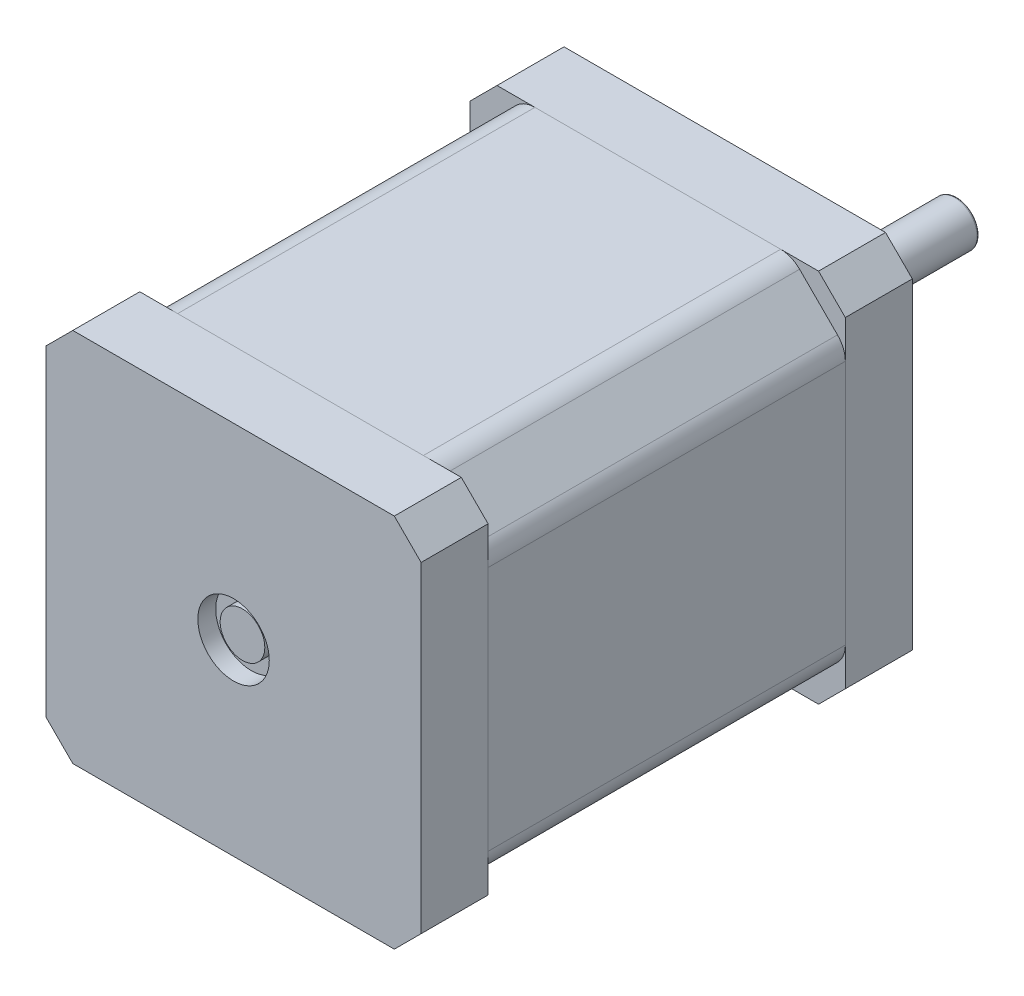
from build123d import *
from build123d.topology import SkipClean

# Parameters (mm, degrees)
IZIM1_R                     = 1.5
Y_KSEKLIK_EKSTR_ZYON1_DEPTH = 40
Y_KSEKLIK_EKSTR_ZYON2_START = 7.5
IZIM2_R                     = 1.5
Y_KSEKLIK_EKSTR_ZYON2_DEPTH = 7.5
IZIM3_R                     = 11
Y_KSEKLIK_EKSTR_ZYON3_DEPTH = 2
RADYUS1_R                   = 1
IZIM4_R                     = 4
KES_EKSTR_ZYON2_DEPTH       = 2
IZIM5_R                     = 2.5
Y_KSEKLIK_EKSTR_ZYON4_DEPTH = 26
IZIM6_W                     = 1.233072443
IZIM6_H                     = 4.616083878
KES_EKSTR_ZYON3_DEPTH       = 17
RADYUS2_R                   = 0.25
Y_KSEKLIK_EKSTR_ZYON5_DEPTH = 7.5
KES_EKSTR_ZYON4_START       = -2
IZIM8_R                     = 4
KES_EKSTR_ZYON4_DEPTH       = 2
Y_KSEKLIK_EKSTR_ZYON7_START = 1
IZIM10_R                    = 2.5
Y_KSEKLIK_EKSTR_ZYON7_DEPTH = 1
IZIM12_W                    = 1.322916666
IZIM12_H                    = 0.118723291
IZIM12_W_2                  = 1.356837607
Y_KSEKLIK_EKSTR_ZYON8_DEPTH = 0.1


with BuildPart() as part:
    # Çizim1 → Yükseklik-Ekstrüzyon1 (new body)
    with BuildSketch(Plane.XY):
        with BuildLine():
            Line((-15.878338215, 20.120978902), (-20.120978902, 15.878338215))
            ThreePointArc((-20.120978902, 15.878338215), (-20.771297156, 14.905068169), (-20.999658559, 13.757017872))
            Line((-20.999658559, 13.757017872), (-20.999658559, -13.757017872))
            ThreePointArc((-20.999658559, -13.757017872), (-20.771297156, -14.905068169), (-20.120978902, -15.878338215))
            Line((-20.120978902, -15.878338215), (-15.878338215, -20.120978902))
            ThreePointArc((-15.878338215, -20.120978902), (-14.905068169, -20.771297156), (-13.757017872, -20.999658559))
            Line((-13.757017872, -20.999658559), (13.757017872, -20.999658559))
            ThreePointArc((13.757017872, -20.999658559), (14.905068169, -20.771297156), (15.878338215, -20.120978902))
            Line((15.878338215, -20.120978902), (20.120978902, -15.878338215))
            ThreePointArc((20.120978902, -15.878338215), (20.771297156, -14.905068169), (20.999658559, -13.757017872))
            Line((20.999658559, -13.757017872), (20.999658559, 13.757017872))
            ThreePointArc((20.999658559, 13.757017872), (20.771297156, 14.905068169), (20.120978902, 15.878338215))
            Line((20.120978902, 15.878338215), (15.878338215, 20.120978902))
            ThreePointArc((15.878338215, 20.120978902), (14.905068169, 20.771297156), (13.757017872, 20.999658559))
            Line((13.757017872, 20.999658559), (-13.757017872, 20.999658559))
            ThreePointArc((-13.757017872, 20.999658559), (-14.905068169, 20.771297156), (-15.878338215, 20.120978902))
        make_face()
        with Locations((-15.5, 15.5)):
            Circle(IZIM1_R, mode=Mode.SUBTRACT)
        with Locations((15.5, 15.5)):
            Circle(IZIM1_R, mode=Mode.SUBTRACT)
        with Locations((15.5, -15.5)):
            Circle(IZIM1_R, mode=Mode.SUBTRACT)
        with Locations((-15.5, -15.5)):
            Circle(IZIM1_R, mode=Mode.SUBTRACT)
    extrude(amount=Y_KSEKLIK_EKSTR_ZYON1_DEPTH)

    # Çizim2 → Yükseklik-Ekstrüzyon2 (add)
    with SkipClean():  # the faces are left unmerged after this step: merging them gives an invalid solid
        with BuildSketch(Plane(origin=(0, 0, 0), x_dir=(-1, 0, 0), z_dir=(0, 0, -1)).offset(Y_KSEKLIK_EKSTR_ZYON2_START)):
            Polygon((-21, 18), (-18, 21), (18, 21), (21, 18), (21, -18), (18, -21), (-18, -21), (-21, -18), align=None)
            with Locations((-15.5, 15.5)):
                Circle(IZIM2_R, mode=Mode.SUBTRACT)
            with Locations((15.5, 15.5)):
                Circle(IZIM2_R, mode=Mode.SUBTRACT)
            with Locations((15.5, -15.5)):
                Circle(IZIM2_R, mode=Mode.SUBTRACT)
            with Locations((-15.5, -15.5)):
                Circle(IZIM2_R, mode=Mode.SUBTRACT)
        extrude(amount=-Y_KSEKLIK_EKSTR_ZYON2_DEPTH)

    # Çizim3 → Yükseklik-Ekstrüzyon3 (add)
    with SkipClean():  # the faces are left unmerged after this step: merging them gives an invalid solid
        with BuildSketch(Plane(origin=(0, 0, -7.5), x_dir=(-1, 0, 0), z_dir=(0, 0, -1))):
            Circle(IZIM3_R)
        extrude(amount=Y_KSEKLIK_EKSTR_ZYON3_DEPTH)

    # Radyus1
    radyus1_edges = [part.edges().sort_by_distance(p)[0] for p in [
        (11, 0, -7.5),
    ]]
    fillet(radyus1_edges, radius=RADYUS1_R)

    # Çizim4 → Kes-Ekstrüzyon2 (cut)
    with BuildSketch(Plane(origin=(0, 0, -9.5), x_dir=(-1, 0, 0), z_dir=(0, 0, -1))):
        Circle(IZIM4_R)
    extrude(amount=-KES_EKSTR_ZYON2_DEPTH, mode=Mode.SUBTRACT)

    # Çizim5 → Yükseklik-Ekstrüzyon4 (add)
    with BuildSketch(Plane(origin=(0, 0, -7.5), x_dir=(-1, 0, 0), z_dir=(0, 0, -1))):
        Circle(IZIM5_R)
    extrude(amount=Y_KSEKLIK_EKSTR_ZYON4_DEPTH)

    # Çizim6 → Kes-Ekstrüzyon3 (cut)
    with BuildSketch(Plane(origin=(0, 0, -33.5), x_dir=(-1, 0, 0), z_dir=(0, 0, -1))):
        with Locations((2.616536222, -0.191958061)):
            Rectangle(IZIM6_W, IZIM6_H)
    extrude(amount=-KES_EKSTR_ZYON3_DEPTH, mode=Mode.SUBTRACT)

    # Radyus2
    radyus2_edges = [part.edges().sort_by_distance(p)[0] for p in [
        (-2, 0, -33.5),
        (2.5, 0, -33.5),
    ]]
    fillet(radyus2_edges, radius=RADYUS2_R)

    # Çizim7 → Yükseklik-Ekstrüzyon5 (add)
    with BuildSketch(Plane.XY.offset(40)):
        Polygon((-18, 21), (18, 21), (21, 18), (21, -18), (18, -21), (-18, -21), (-21, -18), (-21, 18), align=None)
    extrude(amount=Y_KSEKLIK_EKSTR_ZYON5_DEPTH)

    # Çizim8 → Kes-Ekstrüzyon4 (cut)
    with BuildSketch(Plane.XY.offset(47.5).offset(KES_EKSTR_ZYON4_START)):
        Circle(IZIM8_R)
    extrude(amount=KES_EKSTR_ZYON4_DEPTH, mode=Mode.SUBTRACT)

    # Çizim10 → Yükseklik-Ekstrüzyon7 (add)
    with BuildSketch(Plane.XY.offset(45.5).offset(Y_KSEKLIK_EKSTR_ZYON7_START)):
        Circle(IZIM10_R)
    extrude(amount=-Y_KSEKLIK_EKSTR_ZYON7_DEPTH)

    # Çizim12 → Yükseklik-Ekstrüzyon8 (add)
    # profile 1 of 54: a face of its own
    with BuildSketch(Plane.ZY.offset(20.999658559)):
        with BuildLine():
            Line((7.410133378, -7.700053419), (7.34308652, -7.588220319))
            add(Edge.make_bspline(
                [(7.34308652, -7.588220319), (7.36049776, -7.577819081), (7.393857026, -7.557890709), (7.438933725, -7.524647189), (7.477246207, -7.490201119), (7.508571592, -7.454297412), (7.533234117, -7.417155224), (7.550697461, -7.378532084), (7.561589214, -7.33855815), (7.562912163, -7.311353759), (7.563572631, -7.297772269)],
                knots=[0, 0, 0, 0, 1.272034388, 2.437168799, 3.508375237, 4.49857839, 5.41946034, 6.295179144, 7.148887113, 8, 8, 8, 8], degree=3))
            add(Edge.make_bspline(
                [(7.563572631, -7.297772269), (7.563241899, -7.286175715), (7.562586224, -7.263185518), (7.55654057, -7.22927391), (7.546649892, -7.196503749), (7.533242008, -7.165200789), (7.516760804, -7.136194355), (7.49732637, -7.110350647), (7.474870578, -7.088528376), (7.450225308, -7.070437449), (7.423797314, -7.056438822), (7.396567019, -7.045858523), (7.368160805, -7.039932986), (7.349030489, -7.039043807), (7.339376417, -7.038595085)],
                knots=[0, 0, 0, 0, 1.09553864, 2.171907928, 3.244545276, 4.325730702, 5.384330216, 6.391480148, 7.371786628, 8.333890167, 9.27165687, 10.191402356, 11.087295184, 12, 12, 12, 12], degree=3))
            add(Edge.make_bspline(
                [(7.339376417, -7.038595085), (7.328358193, -7.039140371), (7.306045089, -7.040244634), (7.273068398, -7.049976578), (7.240293228, -7.064836848), (7.220015855, -7.078803832), (7.209522818, -7.0860314)],
                knots=[0, 0, 0, 0, 0.938992559, 1.901562324, 2.914110574, 4, 4, 4, 4], degree=3))
            add(Edge.make_bspline(
                [(7.209522818, -7.0860314), (7.201944638, -7.091953651), (7.186035197, -7.104386676), (7.16237361, -7.125779315), (7.137917249, -7.150754321), (7.112129208, -7.178969871), (7.085223682, -7.210473294), (7.056990712, -7.245276778), (7.028007242, -7.283677353), (7.008593923, -7.310630586), (6.998576971, -7.324538011)],
                knots=[0, 0, 0, 0, 0.72225051, 1.516274602, 2.393638633, 3.3469932, 4.386926276, 5.505032946, 6.712638081, 8, 8, 8, 8], degree=3))
            add(Edge.make_bspline(
                [(6.998576971, -7.324538011), (6.988663189, -7.338456605), (6.969708794, -7.365067896), (6.941578186, -7.402282896), (6.915859224, -7.435561607), (6.892309791, -7.464756116), (6.870926693, -7.489853583), (6.85191527, -7.511051777), (6.834761364, -7.527810695), (6.823633238, -7.537129918), (6.818636984, -7.541314019)],
                knots=[0, 0, 0, 0, 1.452282411, 2.77665338, 3.964542531, 5.026858415, 5.96415736, 6.766646006, 7.446254459, 8, 8, 8, 8], degree=3))
            add(Edge.make_bspline(
                [(6.818636984, -7.541314019), (6.810849896, -7.547161293), (6.795535542, -7.558660741), (6.771605762, -7.573856503), (6.747156339, -7.58667113), (6.722098665, -7.596984509), (6.696621062, -7.605324548), (6.670532254, -7.611123015), (6.644009348, -7.614697067), (6.626164386, -7.615066256), (6.617231401, -7.615251068)],
                knots=[0, 0, 0, 0, 1.068019517, 2.100403715, 3.106014851, 4.09224787, 5.069873182, 6.043214339, 7.020455327, 8, 8, 8, 8], degree=3))
            add(Edge.make_bspline(
                [(6.617231401, -7.615251068), (6.603235001, -7.614757752), (6.575541363, -7.613781665), (6.535086655, -7.605526151), (6.496461142, -7.592497405), (6.460056127, -7.574238627), (6.426786295, -7.550723512), (6.396352185, -7.523392346), (6.370417895, -7.491140826), (6.348111682, -7.455435996), (6.330471825, -7.416559596), (6.31768816, -7.3756312), (6.310094823, -7.332945015), (6.309035401, -7.303986), (6.308497844, -7.289292034)],
                knots=[0, 0, 0, 0, 1.005248779, 1.989011071, 2.95484373, 3.928844559, 4.904706341, 5.875556129, 6.859318422, 7.868909462, 8.894684146, 9.918924798, 10.944050749, 12, 12, 12, 12], degree=3))
            add(Edge.make_bspline(
                [(6.308497844, -7.289292034), (6.309028234, -7.273700222), (6.31008301, -7.242693084), (6.31948225, -7.19715613), (6.334441566, -7.153134146), (6.351992763, -7.117878326), (6.369410637, -7.090226948), (6.385310058, -7.069160409), (6.403576245, -7.047696583), (6.424594278, -7.026066143), (6.447943776, -7.004055551), (6.473822392, -6.981766193), (6.50199692, -6.95898948), (6.522115374, -6.944341511), (6.532429051, -6.936832265)],
                knots=[0, 0, 0, 0, 1.286507425, 2.558452658, 3.822738219, 5.118007103, 5.800084425, 6.519418873, 7.295692132, 8.12638276, 9.008892966, 9.945018126, 10.946518512, 12, 12, 12, 12], degree=3))
            Line((6.532429051, -6.936832265), (6.613786306, -7.04416024))
            add(Edge.make_bspline(
                [(6.613786306, -7.04416024), (6.605436824, -7.050640521), (6.589357673, -7.063120029), (6.566847561, -7.082074067), (6.546257648, -7.099911633), (6.52842074, -7.117620434), (6.512001139, -7.133835482), (6.498192787, -7.149852668), (6.486559406, -7.165053886), (6.474121772, -7.184168997), (6.462165698, -7.208383464), (6.451663692, -7.238526579), (6.445433341, -7.270133828), (6.444602308, -7.291650018), (6.444181605, -7.302542401)],
                knots=[0, 0, 0, 0, 1.181392137, 2.275085037, 3.289537922, 4.225335853, 5.084247276, 5.86831218, 6.587234301, 7.222706459, 8.415108401, 9.595592188, 10.782789524, 12, 12, 12, 12], degree=3))
            add(Edge.make_bspline(
                [(6.444181605, -7.302542401), (6.444632099, -7.316211931), (6.445500835, -7.342572331), (6.455238399, -7.379909194), (6.470043709, -7.413708372), (6.491392811, -7.442679587), (6.516845053, -7.466600671), (6.545871543, -7.484118996), (6.577930171, -7.494592895), (6.600282543, -7.495874882), (6.611666247, -7.496527778)],
                knots=[0, 0, 0, 0, 1.144248881, 2.206576175, 3.214949548, 4.222996039, 5.203671638, 6.127710127, 7.046472867, 8, 8, 8, 8], degree=3))
            add(Edge.make_bspline(
                [(6.611666247, -7.496527778), (6.618752234, -7.496370697), (6.633022919, -7.496054346), (6.654006309, -7.492011897), (6.674879059, -7.486546175), (6.69556771, -7.47816696), (6.716540742, -7.466498209), (6.738094381, -7.451191307), (6.760414279, -7.431908532), (6.774931388, -7.417138496), (6.782595985, -7.409340361)],
                knots=[0, 0, 0, 0, 0.858259122, 1.72847414, 2.583651051, 3.473048463, 4.427392529, 5.488649985, 6.674082839, 8, 8, 8, 8], degree=3))
            add(Edge.make_bspline(
                [(6.782595985, -7.409340361), (6.785180218, -7.406444545), (6.791319764, -7.399564748), (6.801371013, -7.38698724), (6.81376968, -7.370377909), (6.829110719, -7.35017047), (6.846906391, -7.32599233), (6.866929155, -7.297840831), (6.889829016, -7.266029776), (6.905839157, -7.243456313), (6.914304635, -7.231520433)],
                knots=[0, 0, 0, 0, 0.420754252, 0.999615792, 1.744751191, 2.668019286, 3.750313428, 4.999500688, 6.413464383, 8, 8, 8, 8], degree=3))
            add(Edge.make_bspline(
                [(6.914304635, -7.231520433), (6.924752418, -7.217162672), (6.944983102, -7.189360858), (6.975378215, -7.149802648), (7.005105541, -7.113935517), (7.03397331, -7.081630885), (7.061769002, -7.052578493), (7.088805477, -7.027071206), (7.114905432, -7.004993291), (7.148139652, -6.980900237), (7.189334684, -6.956573395), (7.239829118, -6.935715127), (7.290468456, -6.922445454), (7.324460196, -6.92072209), (7.341231468, -6.919871795)],
                knots=[0, 0, 0, 0, 1.163604038, 2.253157948, 3.268574773, 4.215621239, 5.091738613, 5.902582348, 6.650434646, 7.330118262, 8.591011492, 9.77460283, 10.902005569, 12, 12, 12, 12], degree=3))
            add(Edge.make_bspline(
                [(7.341231468, -6.919871795), (7.353091617, -6.920120431), (7.3765816, -6.920612874), (7.411075673, -6.926264062), (7.444569237, -6.934562864), (7.476615159, -6.946970264), (7.507727624, -6.962360899), (7.537320534, -6.981610151), (7.565968816, -7.004039174), (7.592869309, -7.029754736), (7.617594329, -7.057879064), (7.639497485, -7.087711534), (7.658181052, -7.118940723), (7.673060681, -7.151904821), (7.684776614, -7.186249706), (7.693241625, -7.222088636), (7.698442725, -7.259457914), (7.698982141, -7.28485824), (7.699256391, -7.297772269)],
                knots=[0, 0, 0, 0, 0.983922938, 1.948738757, 2.895227473, 3.844781104, 4.796118043, 5.772795661, 6.770647148, 7.813532943, 8.8582745, 9.876489951, 10.882905461, 11.874265028, 12.874055871, 13.891769171, 14.928133632, 16, 16, 16, 16], degree=3))
            add(Edge.make_bspline(
                [(7.699256391, -7.297772269), (7.699063177, -7.307764199), (7.698679181, -7.327622222), (7.695284471, -7.356994556), (7.690481488, -7.385773506), (7.682856174, -7.413597958), (7.673604442, -7.440826364), (7.662212935, -7.467340424), (7.648561248, -7.49315253), (7.632953651, -7.518409086), (7.614785313, -7.543039089), (7.593643233, -7.566838227), (7.570066528, -7.590432592), (7.543690977, -7.613654811), (7.514226541, -7.635998249), (7.482112104, -7.657999302), (7.447252166, -7.679550746), (7.422737408, -7.693091546), (7.410133378, -7.700053419)],
                knots=[0, 0, 0, 0, 0.915313873, 1.819100311, 2.706792138, 3.586475221, 4.459428225, 5.3405999, 6.2277379, 7.133009489, 8.059106158, 9.028520402, 10.047404263, 11.114294124, 12.246039232, 13.433834781, 14.680630578, 16, 16, 16, 16], degree=3))
        make_face()
    # profile 2 of 54: a face of its own
    with BuildSketch(Plane.ZY.offset(20.999658559)):
        Polygon((6.478102545, -6.801148504), (6.342418785, -6.801148504), (6.342418785, -6.105769231), (6.478102545, -6.105769231), (6.478102545, -6.394097222), (7.665335451, -6.394097222), (7.665335451, -6.512820513), (6.478102545, -6.512820513), align=None)
    # profile 3 of 54: a face of its own
    with BuildSketch(Plane.ZY.offset(20.999658559)):
        Polygon((6.342418785, -5.86832265), (6.342418785, -5.122061966), (6.478102545, -5.122061966), (6.478102545, -5.749599359), (6.885153827, -5.749599359), (6.885153827, -5.122061966), (7.020837588, -5.122061966), (7.020837588, -5.749599359), (7.529651691, -5.749599359), (7.529651691, -5.122061966), (7.665335451, -5.122061966), (7.665335451, -5.86832265), align=None)
    # profile 4 of 54: a face of its own
    with BuildSketch(Plane.ZY.offset(20.999658559)):
        with BuildLine():
            Line((6.342418785, -4.884615385), (6.342418785, -4.625173194))
            add(Edge.make_bspline(
                [(6.342418785, -4.625173194), (6.3424384, -4.607328595), (6.342475984, -4.573137552), (6.343615486, -4.52410835), (6.34513748, -4.479579076), (6.347247303, -4.439645748), (6.349740657, -4.404185496), (6.353237708, -4.373358779), (6.356889069, -4.346923292), (6.360601327, -4.331083652), (6.362294335, -4.323859842)],
                knots=[0, 0, 0, 0, 1.415646017, 2.712440637, 3.8905458, 4.950247383, 5.884950622, 6.709939814, 7.411656543, 8, 8, 8, 8], degree=3))
            add(Edge.make_bspline(
                [(6.362294335, -4.323859842), (6.364797373, -4.314715342), (6.369744466, -4.296641821), (6.379651213, -4.270597713), (6.391404792, -4.245824205), (6.40477475, -4.222210724), (6.42041922, -4.200187354), (6.437297441, -4.179019933), (6.456500154, -4.159455669), (6.477421702, -4.141229568), (6.499796733, -4.124383688), (6.524031773, -4.110230103), (6.549403275, -4.097854649), (6.576256059, -4.087722237), (6.604616194, -4.080187354), (6.634282136, -4.074593463), (6.665287244, -4.071026591), (6.686476824, -4.070686134), (6.69726362, -4.070512821)],
                knots=[0, 0, 0, 0, 0.999549623, 1.97554611, 2.93413192, 3.889860808, 4.833293765, 5.780583482, 6.742559327, 7.719844669, 8.705620613, 9.691528643, 10.674968152, 11.680406189, 12.713313868, 13.765869198, 14.862690416, 16, 16, 16, 16], degree=3))
            add(Edge.make_bspline(
                [(6.69726362, -4.070512821), (6.708140934, -4.070672109), (6.729423134, -4.070983768), (6.760558087, -4.074724328), (6.790311764, -4.079762823), (6.818618194, -4.087510221), (6.845309273, -4.097657246), (6.870792894, -4.109560492), (6.894635508, -4.123917362), (6.916923674, -4.140414069), (6.937678314, -4.158765415), (6.956749025, -4.178893758), (6.974024177, -4.200717836), (6.989542497, -4.224168291), (7.002944126, -4.24947374), (7.014947632, -4.276250387), (7.025028657, -4.304730975), (7.030331687, -4.324439603), (7.033027926, -4.334460136)],
                knots=[0, 0, 0, 0, 1.121902311, 2.195077645, 3.232258892, 4.234102512, 5.217864754, 6.176164875, 7.132989551, 8.084763148, 9.034132444, 9.988522005, 10.94243251, 11.903244335, 12.886203696, 13.894208494, 14.929344452, 16, 16, 16, 16], degree=3))
            add(Edge.make_bspline(
                [(7.033027926, -4.334460136), (7.034789108, -4.342748241), (7.038648842, -4.360912104), (7.042987074, -4.390824293), (7.046544898, -4.425668641), (7.049865088, -4.465326593), (7.051624374, -4.509890629), (7.053690063, -4.559258542), (7.054664748, -4.613597409), (7.05472636, -4.651497075), (7.054758528, -4.671284472)],
                knots=[0, 0, 0, 0, 0.601372724, 1.317943291, 2.144091499, 3.08771165, 4.142394186, 5.309582461, 6.595334295, 8, 8, 8, 8], degree=3))
            Line((7.054758528, -4.671284472), (7.054758528, -4.765892094))
            Line((7.054758528, -4.765892094), (7.665335451, -4.765892094))
            Line((7.665335451, -4.765892094), (7.665335451, -4.884615385))
            Line((7.665335451, -4.884615385), (6.342418785, -4.884615385))
        make_face()
        with BuildLine():
            Line((6.478102545, -4.765892094), (6.919074767, -4.765892094))
            Line((6.919074767, -4.765892094), (6.921989848, -4.534275674))
            add(Edge.make_bspline(
                [(6.921989848, -4.534275674), (6.921996076, -4.522966576), (6.922008097, -4.501134594), (6.920496662, -4.469598746), (6.918775131, -4.440336289), (6.916171416, -4.413457262), (6.912758357, -4.388867353), (6.908513877, -4.366778957), (6.903899452, -4.346861707), (6.896189893, -4.323950769), (6.884335655, -4.29819812), (6.867079167, -4.270065317), (6.844724212, -4.246407722), (6.819659579, -4.225973134), (6.791851302, -4.209437792), (6.761941601, -4.197772768), (6.730373585, -4.190589928), (6.708785412, -4.18969286), (6.697793634, -4.189236111)],
                knots=[0, 0, 0, 0, 1.160746174, 2.240796558, 3.240300023, 4.169675897, 5.012224395, 5.787635701, 6.478238024, 7.109103438, 8.265591281, 9.382545711, 10.479929969, 11.588830844, 12.694575677, 13.785760505, 14.872603606, 16, 16, 16, 16], degree=3))
            add(Edge.make_bspline(
                [(6.697793634, -4.189236111), (6.687157957, -4.189713366), (6.666015546, -4.19066209), (6.635029373, -4.197713492), (6.605458724, -4.209563053), (6.577874391, -4.22598759), (6.552864911, -4.245926262), (6.531102271, -4.269082266), (6.513724279, -4.295514843), (6.502075761, -4.31989827), (6.495255964, -4.341733328), (6.490330274, -4.360605607), (6.486933671, -4.382023437), (6.483683545, -4.405783316), (6.481060045, -4.431855077), (6.479238187, -4.460404425), (6.478183137, -4.49133629), (6.47813006, -4.512809232), (6.478102545, -4.523940388)],
                knots=[0, 0, 0, 0, 1.120540835, 2.227496496, 3.330685923, 4.466139262, 5.598993257, 6.692710361, 7.80064471, 8.921224235, 9.527843361, 10.209888745, 10.975318552, 11.811557897, 12.738105936, 13.73658638, 14.826690375, 16, 16, 16, 16], degree=3))
            Line((6.478102545, -4.523940388), (6.478102545, -4.765892094))
        make_face(mode=Mode.SUBTRACT)
    # profile 5 of 54: a face of its own
    with BuildSketch(Plane.ZY.offset(20.999658559)):
        with BuildLine():
            Line((6.342418785, -3.799145299), (6.342418785, -3.539703108))
            add(Edge.make_bspline(
                [(6.342418785, -3.539703108), (6.3424384, -3.52185851), (6.342475984, -3.487667467), (6.343615486, -3.438638264), (6.34513748, -3.394108991), (6.347247303, -3.354175662), (6.349740657, -3.318715411), (6.353237708, -3.287888693), (6.356889069, -3.261453206), (6.360601327, -3.245613566), (6.362294335, -3.238389757)],
                knots=[0, 0, 0, 0, 1.415646017, 2.712440637, 3.8905458, 4.950247383, 5.884950622, 6.709939814, 7.411656543, 8, 8, 8, 8], degree=3))
            add(Edge.make_bspline(
                [(6.362294335, -3.238389757), (6.364797373, -3.229245257), (6.369744466, -3.211171736), (6.379651213, -3.185127628), (6.391404792, -3.160354119), (6.40477475, -3.136740639), (6.42041922, -3.114717269), (6.437297441, -3.093549847), (6.456500154, -3.073985584), (6.477421702, -3.055759482), (6.499796733, -3.038913603), (6.524031773, -3.024760017), (6.549403275, -3.012384564), (6.576256059, -3.002252151), (6.604616194, -2.994717269), (6.634282136, -2.989123377), (6.665287244, -2.985556506), (6.686476824, -2.985216049), (6.69726362, -2.985042735)],
                knots=[0, 0, 0, 0, 0.999549623, 1.97554611, 2.93413192, 3.889860808, 4.833293765, 5.780583482, 6.742559327, 7.719844669, 8.705620613, 9.691528643, 10.674968152, 11.680406189, 12.713313868, 13.765869198, 14.862690416, 16, 16, 16, 16], degree=3))
            add(Edge.make_bspline(
                [(6.69726362, -2.985042735), (6.708140934, -2.985202024), (6.729423134, -2.985513682), (6.760558087, -2.989254243), (6.790311764, -2.994292738), (6.818618194, -3.002040135), (6.845309273, -3.012187161), (6.870792894, -3.024090407), (6.894635508, -3.038447277), (6.916923674, -3.054943983), (6.937678314, -3.07329533), (6.956749025, -3.093423673), (6.974024177, -3.115247751), (6.989542497, -3.138698205), (7.002944126, -3.164003654), (7.014947632, -3.190780301), (7.025028657, -3.219260889), (7.030331687, -3.238969518), (7.033027926, -3.248990051)],
                knots=[0, 0, 0, 0, 1.121902311, 2.195077645, 3.232258892, 4.234102512, 5.217864754, 6.176164875, 7.132989551, 8.084763148, 9.034132444, 9.988522005, 10.94243251, 11.903244335, 12.886203696, 13.894208494, 14.929344452, 16, 16, 16, 16], degree=3))
            add(Edge.make_bspline(
                [(7.033027926, -3.248990051), (7.034789108, -3.257278155), (7.038648842, -3.275442018), (7.042987074, -3.305354207), (7.046544898, -3.340198556), (7.049865088, -3.379856507), (7.051624374, -3.424420544), (7.053690063, -3.473788457), (7.054664748, -3.528127324), (7.05472636, -3.566026989), (7.054758528, -3.585814386)],
                knots=[0, 0, 0, 0, 0.601372724, 1.317943291, 2.144091499, 3.08771165, 4.142394186, 5.309582461, 6.595334295, 8, 8, 8, 8], degree=3))
            Line((7.054758528, -3.585814386), (7.054758528, -3.680422009))
            Line((7.054758528, -3.680422009), (7.665335451, -3.680422009))
            Line((7.665335451, -3.680422009), (7.665335451, -3.799145299))
            Line((7.665335451, -3.799145299), (6.342418785, -3.799145299))
        make_face()
        with BuildLine():
            Line((6.478102545, -3.680422009), (6.919074767, -3.680422009))
            Line((6.919074767, -3.680422009), (6.921989848, -3.448805589))
            add(Edge.make_bspline(
                [(6.921989848, -3.448805589), (6.921996076, -3.43749649), (6.922008097, -3.415664508), (6.920496662, -3.38412866), (6.918775131, -3.354866203), (6.916171416, -3.327987177), (6.912758357, -3.303397267), (6.908513877, -3.281308871), (6.903899452, -3.261391621), (6.896189893, -3.238480683), (6.884335655, -3.212728034), (6.867079167, -3.184595231), (6.844724212, -3.160937636), (6.819659579, -3.140503048), (6.791851302, -3.123967707), (6.761941601, -3.112302683), (6.730373585, -3.105119842), (6.708785412, -3.104222774), (6.697793634, -3.103766026)],
                knots=[0, 0, 0, 0, 1.160746174, 2.240796558, 3.240300023, 4.169675897, 5.012224395, 5.787635701, 6.478238024, 7.109103438, 8.265591281, 9.382545711, 10.479929969, 11.588830844, 12.694575677, 13.785760505, 14.872603606, 16, 16, 16, 16], degree=3))
            add(Edge.make_bspline(
                [(6.697793634, -3.103766026), (6.687157957, -3.104243281), (6.666015546, -3.105192005), (6.635029373, -3.112243407), (6.605458724, -3.124092967), (6.577874391, -3.140517504), (6.552864911, -3.160456176), (6.531102271, -3.183612181), (6.513724279, -3.210044757), (6.502075761, -3.234428184), (6.495255964, -3.256263243), (6.490330274, -3.275135522), (6.486933671, -3.296553352), (6.483683545, -3.320313231), (6.481060045, -3.346384991), (6.479238187, -3.37493434), (6.478183137, -3.405866204), (6.47813006, -3.427339147), (6.478102545, -3.438470302)],
                knots=[0, 0, 0, 0, 1.120540835, 2.227496496, 3.330685923, 4.466139262, 5.598993257, 6.692710361, 7.80064471, 8.921224235, 9.527843361, 10.209888745, 10.975318552, 11.811557897, 12.738105936, 13.73658638, 14.826690375, 16, 16, 16, 16], degree=3))
            Line((6.478102545, -3.438470302), (6.478102545, -3.680422009))
        make_face(mode=Mode.SUBTRACT)
    # profile 6 of 54: a face of its own
    with BuildSketch(Plane.ZY.offset(20.999658559)):
        with Locations((7.003877118, -2.654313569)):
            Rectangle(IZIM12_W, IZIM12_H)
    # profile 7 of 54: a face of its own
    with BuildSketch(Plane.ZY.offset(20.999658559)):
        Polygon((7.665335451, -2.306623932), (6.342418785, -2.306623932), (6.342418785, -2.281713241), (7.383632643, -1.407719017), (6.342418785, -1.407719017), (6.342418785, -1.288995726), (7.665335451, -1.288995726), (7.665335451, -1.316026476), (6.626506658, -2.187900641), (7.665335451, -2.187900641), align=None)
    # profile 8 of 54: a face of its own
    with BuildSketch(Plane.ZY.offset(20.999658559)):
        with BuildLine():
            Line((6.568205043, 0.288327991), (6.664667716, 0.186565171))
            add(Edge.make_bspline(
                [(6.664667716, 0.186565171), (6.647338936, 0.168154298), (6.61309459, 0.131771571), (6.568734268, 0.072353735), (6.530357239, 0.010609112), (6.499364858, -0.053562135), (6.475052802, -0.118477278), (6.457380161, -0.183020097), (6.446188225, -0.246772698), (6.444843984, -0.289168134), (6.444181605, -0.310058594)],
                knots=[0, 0, 0, 0, 1.089067066, 2.152164705, 3.18986567, 4.218445106, 5.218487318, 6.173592265, 7.100032889, 8, 8, 8, 8], degree=3))
            add(Edge.make_bspline(
                [(6.444181605, -0.310058594), (6.444337938, -0.322877543), (6.444650199, -0.348482194), (6.448635661, -0.386514894), (6.454367619, -0.424148712), (6.462661126, -0.461312606), (6.473172288, -0.498078837), (6.486320367, -0.53431953), (6.501649279, -0.570102298), (6.519362195, -0.605090049), (6.538820287, -0.63900991), (6.560383512, -0.671045658), (6.583359371, -0.701403369), (6.608328204, -0.729505599), (6.635045188, -0.755539281), (6.663029172, -0.779983266), (6.692830354, -0.802381976), (6.724326184, -0.822333691), (6.756783927, -0.840350906), (6.789928308, -0.855920577), (6.823451641, -0.869455887), (6.85760635, -0.879764795), (6.892040314, -0.888496376), (6.926933984, -0.8945747), (6.962378481, -0.898012891), (6.986114516, -0.898606499), (6.998046956, -0.898904915)],
                knots=[0, 0, 0, 0, 1.028150113, 2.053633673, 3.06513288, 4.081487945, 5.106702018, 6.131327874, 7.172780699, 8.228344599, 9.276313556, 10.308389736, 11.324843658, 12.329040066, 13.321460474, 14.316307835, 15.308626991, 16.309440696, 17.305625405, 18.28535951, 19.246194545, 20.203493668, 21.145557131, 22.095268976, 23.042464743, 24, 24, 24, 24], degree=3))
            add(Edge.make_bspline(
                [(6.998046956, -0.898904915), (7.010244498, -0.898619091), (7.034606274, -0.898048224), (7.070966223, -0.894399545), (7.106781955, -0.887612903), (7.142109803, -0.878612629), (7.177020076, -0.867170278), (7.211476341, -0.853112393), (7.24547525, -0.83636573), (7.278679293, -0.817024209), (7.310996307, -0.795664975), (7.341692691, -0.772173308), (7.370411215, -0.746509656), (7.397571353, -0.719144579), (7.423001696, -0.689828747), (7.44639572, -0.65827774), (7.46811517, -0.624933212), (7.487921438, -0.589780372), (7.505613508, -0.553190773), (7.521346469, -0.515674205), (7.53430321, -0.477110087), (7.544863157, -0.437701282), (7.553518922, -0.397494715), (7.559087449, -0.356286314), (7.563128328, -0.31437907), (7.563423781, -0.286129647), (7.563572631, -0.271897536)],
                knots=[0, 0, 0, 0, 0.935915162, 1.869274651, 2.799799983, 3.730201895, 4.664668062, 5.616159355, 6.583070886, 7.570012957, 8.562524459, 9.553461134, 10.53281078, 11.515274572, 12.509912756, 13.507571325, 14.526460018, 15.561318395, 16.601025881, 17.643204557, 18.680545676, 19.719612342, 20.772381578, 21.833430283, 22.908478249, 24, 24, 24, 24], degree=3))
            add(Edge.make_bspline(
                [(7.563572631, -0.271897536), (7.56321424, -0.254745531), (7.562510482, -0.221064784), (7.557027608, -0.171556018), (7.548475341, -0.124001844), (7.535911771, -0.078557072), (7.520009387, -0.035056777), (7.500343823, 0.006338604), (7.477121992, 0.045743375), (7.450814133, 0.08298698), (7.421502659, 0.117184006), (7.390155315, 0.148307351), (7.35636597, 0.17528677), (7.320638205, 0.198928167), (7.282630278, 0.218468494), (7.242553627, 0.234512026), (7.200383457, 0.24680852), (7.171244698, 0.251856425), (7.156521349, 0.254407051)],
                knots=[0, 0, 0, 0, 1.130199668, 2.219330667, 3.279027493, 4.311506524, 5.322739849, 6.327972234, 7.327472899, 8.33386792, 9.329086447, 10.29244429, 11.240784345, 12.174119183, 13.111530729, 14.052100829, 15.015757696, 16, 16, 16, 16], degree=3))
            Line((7.156521349, 0.254407051), (7.156521349, -0.186565171))
            Line((7.156521349, -0.186565171), (7.020837588, -0.186565171))
            Line((7.020837588, -0.186565171), (7.020837588, 0.373130342))
            add(Edge.make_bspline(
                [(7.020837588, 0.373130342), (7.046127026, 0.372485572), (7.095623024, 0.37122364), (7.167805239, 0.362371848), (7.235981445, 0.348078107), (7.300223439, 0.328551739), (7.360440184, 0.303274475), (7.416692818, 0.272517597), (7.468617932, 0.235788849), (7.516639431, 0.194396509), (7.559475175, 0.147943251), (7.597123848, 0.097684279), (7.628837038, 0.043536556), (7.654637944, -0.014448699), (7.674774245, -0.07608166), (7.689051002, -0.141504947), (7.697604589, -0.210629838), (7.698697462, -0.258004117), (7.699256391, -0.282232823)],
                knots=[0, 0, 0, 0, 1.140356446, 2.231883559, 3.274166699, 4.278491846, 5.25512956, 6.21435461, 7.1637429, 8.11826594, 9.068280886, 10.0076534, 10.945064095, 11.891975133, 12.864533718, 13.863980011, 14.907571808, 16, 16, 16, 16], degree=3))
            add(Edge.make_bspline(
                [(7.699256391, -0.282232823), (7.699041277, -0.297166713), (7.698617002, -0.326621158), (7.695601755, -0.370122789), (7.69095999, -0.412424984), (7.683950374, -0.453521583), (7.675364776, -0.493563754), (7.664370689, -0.532351514), (7.651644722, -0.570032619), (7.637169869, -0.60666531), (7.62039844, -0.641917088), (7.60176057, -0.675944968), (7.581352365, -0.708937045), (7.558820885, -0.740668587), (7.534334657, -0.771304926), (7.507844605, -0.800648519), (7.479431711, -0.828863639), (7.459255716, -0.846537981), (7.449089458, -0.85544371)],
                knots=[0, 0, 0, 0, 1.107784379, 2.184907829, 3.233506516, 4.263428166, 5.276301166, 6.270063455, 7.25232949, 8.225834625, 9.190232166, 10.146266622, 11.1027726, 12.066435141, 13.031522626, 14.010570082, 14.99756817, 16, 16, 16, 16], degree=3))
            add(Edge.make_bspline(
                [(7.449089458, -0.85544371), (7.432960967, -0.868365178), (7.400971701, -0.893993632), (7.349718151, -0.926982697), (7.296649591, -0.955104656), (7.241618288, -0.977922255), (7.184675716, -0.99573933), (7.125894639, -1.008517288), (7.065199362, -1.016003972), (7.024126479, -1.017082541), (7.003347103, -1.017628205)],
                knots=[0, 0, 0, 0, 1.023165419, 2.029347347, 3.013907458, 3.994755782, 4.975994455, 5.96558838, 6.970761222, 8, 8, 8, 8], degree=3))
            add(Edge.make_bspline(
                [(7.003347103, -1.017628205), (6.98778724, -1.017427032), (6.956865269, -1.017027242), (6.9109573, -1.012179502), (6.865864476, -1.005224206), (6.821623673, -0.995001055), (6.778205295, -0.982113509), (6.735589357, -0.966029193), (6.693750056, -0.947302825), (6.652977845, -0.925535283), (6.613804539, -0.901318825), (6.576421836, -0.875008789), (6.541435597, -0.846402158), (6.508764775, -0.815415634), (6.477925148, -0.782673851), (6.449560908, -0.747489445), (6.4232282, -0.710395491), (6.399433008, -0.671104435), (6.378051706, -0.630236277), (6.359308592, -0.587879855), (6.343817759, -0.54405056), (6.33067413, -0.499076097), (6.320954411, -0.452616216), (6.313905631, -0.40500802), (6.309082428, -0.356003365), (6.308694527, -0.322879033), (6.308497844, -0.306083484)],
                knots=[0, 0, 0, 0, 1.00895651, 2.005089799, 2.991467152, 3.967318338, 4.948153826, 5.927364234, 6.919980553, 7.91976625, 8.923240147, 9.905815003, 10.88314567, 11.851989312, 12.825009789, 13.798721852, 14.781296708, 15.773896486, 16.776076962, 17.771600213, 18.775744723, 19.78957137, 20.808953803, 21.851964491, 22.910847925, 24, 24, 24, 24], degree=3))
            add(Edge.make_bspline(
                [(6.308497844, -0.306083484), (6.308716878, -0.29238629), (6.309151197, -0.265226366), (6.312161645, -0.224810985), (6.316933171, -0.185020292), (6.323444486, -0.145795287), (6.332313203, -0.107269547), (6.342926126, -0.069333322), (6.355282856, -0.03193162), (6.370019712, 0.004818343), (6.386746528, 0.041163671), (6.405574816, 0.07730645), (6.426826529, 0.113123188), (6.45056477, 0.148676), (6.476381836, 0.184189077), (6.505016112, 0.219100713), (6.535338403, 0.254253611), (6.557140895, 0.276857273), (6.568205043, 0.288327991)],
                knots=[0, 0, 0, 0, 0.985871117, 1.954866573, 2.915460327, 3.869826059, 4.81536089, 5.759505086, 6.70452669, 7.649098992, 8.607881297, 9.583363685, 10.581137262, 11.603961102, 12.659522466, 13.73993555, 14.853081303, 16, 16, 16, 16], degree=3))
        make_face()
    # profile 9 of 54: a face of its own
    with BuildSketch(Plane.ZY.offset(20.999658559)):
        Polygon((7.665335451, 1.085470085), (6.342418785, 1.260109926), (6.342418785, 1.277070396), (7.42788887, 1.823250534), (6.342418785, 2.368105636), (6.342418785, 2.385331113), (7.665335451, 2.561030983), (7.665335451, 2.441777678), (6.713429068, 2.315104167), (7.665335451, 1.837560931), (7.665335451, 1.810795189), (6.711309009, 1.331396902), (7.665335451, 1.204988398), align=None)
    # profile 10 of 54: a face of its own
    with BuildSketch(Plane.ZY.offset(20.999658559)):
        with BuildLine():
            add(Edge.make_bspline(
                [(6.308497844, 3.451455662), (6.30910784, 3.475954254), (6.310305921, 3.52407151), (6.319779813, 3.594723395), (6.335372849, 3.662375742), (6.357393545, 3.727067445), (6.385940611, 3.788552465), (6.42061712, 3.847004452), (6.461633808, 3.902248231), (6.508388386, 3.953903536), (6.559592278, 4.001025142), (6.614407016, 4.042374596), (6.672143434, 4.077256762), (6.732804543, 4.105811614), (6.796248716, 4.128229066), (6.862831525, 4.143694402), (6.932116873, 4.153574298), (6.979374081, 4.154729268), (7.003347103, 4.155315171)],
                knots=[0, 0, 0, 0, 1.065064174, 2.09187391, 3.093564831, 4.079973196, 5.057907931, 6.036227367, 7.030399151, 8.044883615, 9.061699972, 10.052012555, 11.025713132, 11.989727027, 12.962874294, 13.945865945, 14.957962116, 16, 16, 16, 16], degree=3))
            add(Edge.make_bspline(
                [(7.003347103, 4.155315171), (7.027143396, 4.154729071), (7.074048645, 4.1535738), (7.142896298, 4.143686386), (7.20906992, 4.128160059), (7.272422016, 4.106089173), (7.33295992, 4.077512409), (7.390740046, 4.042578891), (7.445701194, 4.001307914), (7.49725784, 3.95438641), (7.544420234, 3.903084974), (7.586019302, 3.848480904), (7.620916653, 3.790746026), (7.649790295, 3.730478643), (7.67174057, 3.667205516), (7.687721095, 3.601387085), (7.697502911, 3.53266475), (7.698665484, 3.48585049), (7.699256391, 3.462055956)],
                knots=[0, 0, 0, 0, 1.043748596, 2.057349401, 3.045489418, 4.02252776, 4.995289225, 5.97782527, 6.980224157, 8.006516136, 9.032559198, 10.034193337, 11.013412982, 11.987833483, 12.961212594, 13.946489799, 14.956251404, 16, 16, 16, 16], degree=3))
            add(Edge.make_bspline(
                [(7.699256391, 3.462055956), (7.69867076, 3.438083074), (7.697516325, 3.390826141), (7.687620377, 3.321453511), (7.672145539, 3.254824721), (7.650030365, 3.191130309), (7.621448852, 3.130334755), (7.586597793, 3.072319158), (7.545244498, 3.017316385), (7.498312489, 2.965782452), (7.447220861, 2.918630225), (7.392476961, 2.87752177), (7.335154809, 2.842662873), (7.275095328, 2.814177328), (7.21258886, 2.791625583), (7.147218454, 2.776240131), (7.079356795, 2.766285768), (7.03315189, 2.765138668), (7.009707279, 2.764556624)],
                knots=[0, 0, 0, 0, 1.053102029, 2.075944431, 3.073151272, 4.055350789, 5.033113405, 6.020478099, 7.024410459, 8.052272461, 9.079885166, 10.07527673, 11.055994387, 12.023226415, 12.992069828, 13.970394897, 14.97016774, 16, 16, 16, 16], degree=3))
            add(Edge.make_bspline(
                [(7.009707279, 2.764556624), (6.993971122, 2.764758703), (6.962697325, 2.765160313), (6.916256676, 2.769995268), (6.870562885, 2.777011149), (6.82574589, 2.787066039), (6.781915399, 2.800216461), (6.738769128, 2.81573315), (6.696744328, 2.834684817), (6.655641915, 2.856108753), (6.616102617, 2.88002021), (6.578728489, 2.90643158), (6.54320591, 2.934415186), (6.510455406, 2.965093016), (6.479524232, 2.997453994), (6.450887729, 3.032023084), (6.424287673, 3.068589349), (6.400316294, 3.107310129), (6.378635907, 3.147231322), (6.360031219, 3.188384152), (6.344063214, 3.230209701), (6.331120997, 3.272903869), (6.320903531, 3.31635328), (6.31394599, 3.360652764), (6.309098703, 3.405767029), (6.308698992, 3.436160593), (6.308497844, 3.451455662)],
                knots=[0, 0, 0, 0, 1.037015668, 2.060948919, 3.074880161, 4.083647147, 5.086022904, 6.090072063, 7.104153813, 8.122640571, 9.144368836, 10.147691507, 11.138137339, 12.123020368, 13.103399296, 14.087645067, 15.080126199, 16.082011238, 17.087798457, 18.072939717, 19.057185487, 20.037253025, 21.01195951, 21.997135196, 22.992090687, 24, 24, 24, 24], degree=3))
        make_face()
        with BuildLine():
            add(Edge.make_bspline(
                [(6.444181605, 3.457285824), (6.44433411, 3.444731323), (6.444637663, 3.419742342), (6.448658042, 3.382595501), (6.454347066, 3.345925922), (6.462609524, 3.309804565), (6.473296654, 3.274155677), (6.486186177, 3.238963431), (6.501765098, 3.20434849), (6.519285486, 3.170354097), (6.539185845, 3.137765413), (6.560318082, 3.106503953), (6.583467375, 3.077382855), (6.608133084, 3.050002077), (6.634529271, 3.024429711), (6.662482588, 3.000677038), (6.692113941, 2.978763536), (6.723301385, 2.958952924), (6.755870792, 2.941323025), (6.789199577, 2.925538238), (6.823679421, 2.912453251), (6.859095161, 2.902087993), (6.895290726, 2.893290263), (6.932463325, 2.887771676), (6.970484808, 2.883711683), (6.996180476, 2.883424946), (7.009177265, 2.883279915)],
                knots=[0, 0, 0, 0, 1.008406545, 2.007172654, 2.999155034, 3.989332444, 4.982025741, 5.988181096, 6.998684226, 8.030553839, 9.059268815, 10.065399129, 11.060956322, 12.046057109, 13.024974577, 14.012068307, 14.991706172, 15.984221787, 16.978487447, 17.966117052, 18.945677757, 19.938371053, 20.93015022, 21.936155317, 22.956113857, 24, 24, 24, 24], degree=3))
            add(Edge.make_bspline(
                [(7.009177265, 2.883279915), (7.028288146, 2.883762884), (7.065885161, 2.884713036), (7.120988248, 2.892996745), (7.173996205, 2.905858021), (7.224593084, 2.924504442), (7.273004511, 2.948291631), (7.319042084, 2.977307173), (7.362692225, 3.011816788), (7.403630001, 3.050993625), (7.440980655, 3.093832463), (7.473812077, 3.139299201), (7.501443917, 3.187034125), (7.524543514, 3.236762102), (7.54194579, 3.2889077), (7.554353604, 3.343136583), (7.562395462, 3.399449949), (7.563176517, 3.437824245), (7.563572631, 3.457285824)],
                knots=[0, 0, 0, 0, 1.032022337, 2.030307203, 3.003823408, 3.974715386, 4.937372378, 5.913284036, 6.909147208, 7.938749767, 8.970518239, 9.975863271, 10.963918693, 11.946286286, 12.933361397, 13.927862637, 14.949112547, 16, 16, 16, 16], degree=3))
            add(Edge.make_bspline(
                [(7.563572631, 3.457285824), (7.563393046, 3.470367443), (7.563036877, 3.496312223), (7.559444478, 3.534901145), (7.553695169, 3.572798437), (7.545376459, 3.609934078), (7.535102936, 3.646356723), (7.522359689, 3.681956472), (7.50708359, 3.716721502), (7.490058883, 3.750822759), (7.470719276, 3.783496684), (7.44987192, 3.814568518), (7.427131088, 3.843639445), (7.40279665, 3.871007377), (7.376481604, 3.896400523), (7.34869817, 3.920085568), (7.319003928, 3.94162018), (7.287944221, 3.961363634), (7.255612264, 3.979208644), (7.222191851, 3.994536852), (7.187862228, 4.007627458), (7.15259817, 4.01817997), (7.116479002, 4.02645318), (7.07945303, 4.032152752), (7.041595224, 4.036139886), (7.015989654, 4.036440396), (7.003082096, 4.03659188)],
                knots=[0, 0, 0, 0, 1.047334373, 2.07717862, 3.100662057, 4.115010574, 5.122652213, 6.129548646, 7.140165612, 8.16200981, 9.179904151, 10.178566626, 11.156366481, 12.133321541, 13.108841334, 14.082538371, 15.054589433, 16.043660176, 17.028268541, 18.009491307, 18.985652105, 19.968123554, 20.954864208, 21.950389976, 22.966808393, 24, 24, 24, 24], degree=3))
            add(Edge.make_bspline(
                [(7.003082096, 4.03659188), (6.990262843, 4.036440269), (6.964833493, 4.036139521), (6.927239672, 4.032154716), (6.890480273, 4.026446939), (6.85469961, 4.018221154), (6.819888559, 4.007618864), (6.786079821, 3.994545675), (6.753147429, 3.979129808), (6.721172829, 3.961437393), (6.6904906, 3.941549941), (6.661159148, 3.919818205), (6.633726842, 3.89586866), (6.607525728, 3.870379309), (6.583079882, 3.842737331), (6.56048376, 3.812937904), (6.538719254, 3.781722994), (6.519457425, 3.748386699), (6.501580098, 3.714105858), (6.486327994, 3.678897511), (6.473228597, 3.643264485), (6.462577621, 3.607064313), (6.454378715, 3.570314105), (6.448652951, 3.533035234), (6.444639043, 3.495357823), (6.444334568, 3.470016762), (6.444181605, 3.457285824)],
                knots=[0, 0, 0, 0, 1.029877221, 2.042951179, 3.035109885, 4.018542222, 4.991021277, 5.957494829, 6.929429462, 7.911425532, 8.892163142, 9.866273635, 10.842761649, 11.81676864, 12.802607151, 13.805177466, 14.821356543, 15.858816981, 16.897175917, 17.927346774, 18.940346092, 19.946830556, 20.957962087, 21.964146003, 22.97721996, 24, 24, 24, 24], degree=3))
        make_face(mode=Mode.SUBTRACT)
    # profile 11 of 54: a face of its own
    with BuildSketch(Plane.ZY.offset(20.999658559)):
        Polygon((6.478102545, 4.274038462), (6.342418785, 4.274038462), (6.342418785, 4.969417735), (6.478102545, 4.969417735), (6.478102545, 4.681089744), (7.665335451, 4.681089744), (7.665335451, 4.562366453), (6.478102545, 4.562366453), align=None)
    # profile 12 of 54: a face of its own
    with BuildSketch(Plane.ZY.offset(20.999658559)):
        with BuildLine():
            add(Edge.make_bspline(
                [(6.308497844, 5.825921474), (6.30910784, 5.850420066), (6.310305921, 5.898537322), (6.319779813, 5.969189207), (6.335372849, 6.036841554), (6.357393545, 6.101533257), (6.385940611, 6.163018277), (6.42061712, 6.221470264), (6.461633808, 6.276714043), (6.508388386, 6.328369348), (6.559592278, 6.375490954), (6.614407016, 6.416840408), (6.672143434, 6.451722574), (6.732804543, 6.480277426), (6.796248716, 6.502694878), (6.862831525, 6.518160214), (6.932116873, 6.52804011), (6.979374081, 6.52919508), (7.003347103, 6.529780983)],
                knots=[0, 0, 0, 0, 1.065064174, 2.09187391, 3.093564831, 4.079973196, 5.057907931, 6.036227367, 7.030399151, 8.044883615, 9.061699972, 10.052012555, 11.025713132, 11.989727027, 12.962874294, 13.945865945, 14.957962116, 16, 16, 16, 16], degree=3))
            add(Edge.make_bspline(
                [(7.003347103, 6.529780983), (7.027143396, 6.529194883), (7.074048645, 6.528039612), (7.142896298, 6.518152198), (7.20906992, 6.502625871), (7.272422016, 6.480554985), (7.33295992, 6.451978221), (7.390740046, 6.417044703), (7.445701194, 6.375773726), (7.49725784, 6.328852222), (7.544420234, 6.277550786), (7.586019302, 6.222946716), (7.620916653, 6.165211838), (7.649790295, 6.104944455), (7.67174057, 6.041671328), (7.687721095, 5.975852897), (7.697502911, 5.907130562), (7.698665484, 5.860316302), (7.699256391, 5.836521768)],
                knots=[0, 0, 0, 0, 1.043748596, 2.057349401, 3.045489418, 4.02252776, 4.995289225, 5.97782527, 6.980224157, 8.006516136, 9.032559198, 10.034193337, 11.013412982, 11.987833483, 12.961212594, 13.946489799, 14.956251404, 16, 16, 16, 16], degree=3))
            add(Edge.make_bspline(
                [(7.699256391, 5.836521768), (7.69867076, 5.812548886), (7.697516325, 5.765291953), (7.687620377, 5.695919323), (7.672145539, 5.629290533), (7.650030365, 5.565596121), (7.621448852, 5.504800567), (7.586597793, 5.44678497), (7.545244498, 5.391782197), (7.498312489, 5.340248264), (7.447220861, 5.293096037), (7.392476961, 5.251987582), (7.335154809, 5.217128685), (7.275095328, 5.18864314), (7.21258886, 5.166091395), (7.147218454, 5.150705943), (7.079356795, 5.14075158), (7.03315189, 5.13960448), (7.009707279, 5.139022436)],
                knots=[0, 0, 0, 0, 1.053102029, 2.075944431, 3.073151272, 4.055350789, 5.033113405, 6.020478099, 7.024410459, 8.052272461, 9.079885166, 10.07527673, 11.055994387, 12.023226415, 12.992069828, 13.970394897, 14.97016774, 16, 16, 16, 16], degree=3))
            add(Edge.make_bspline(
                [(7.009707279, 5.139022436), (6.993971122, 5.139224515), (6.962697325, 5.139626125), (6.916256676, 5.14446108), (6.870562885, 5.151476961), (6.82574589, 5.161531851), (6.781915399, 5.174682273), (6.738769128, 5.190198962), (6.696744328, 5.209150629), (6.655641915, 5.230574565), (6.616102617, 5.254486022), (6.578728489, 5.280897392), (6.54320591, 5.308880998), (6.510455406, 5.339558828), (6.479524232, 5.371919806), (6.450887729, 5.406488896), (6.424287673, 5.443055161), (6.400316294, 5.481775941), (6.378635907, 5.521697134), (6.360031219, 5.562849964), (6.344063214, 5.604675513), (6.331120997, 5.647369681), (6.320903531, 5.690819092), (6.31394599, 5.735118576), (6.309098703, 5.780232841), (6.308698992, 5.810626405), (6.308497844, 5.825921474)],
                knots=[0, 0, 0, 0, 1.037015668, 2.060948919, 3.074880161, 4.083647147, 5.086022904, 6.090072063, 7.104153813, 8.122640571, 9.144368836, 10.147691507, 11.138137339, 12.123020368, 13.103399296, 14.087645067, 15.080126199, 16.082011238, 17.087798457, 18.072939717, 19.057185487, 20.037253025, 21.01195951, 21.997135196, 22.992090687, 24, 24, 24, 24], degree=3))
        make_face()
        with BuildLine():
            add(Edge.make_bspline(
                [(6.444181605, 5.831751636), (6.44433411, 5.819197135), (6.444637663, 5.794208154), (6.448658042, 5.757061313), (6.454347066, 5.720391734), (6.462609524, 5.684270377), (6.473296654, 5.648621489), (6.486186177, 5.613429243), (6.501765098, 5.578814302), (6.519285486, 5.544819909), (6.539185845, 5.512231225), (6.560318082, 5.480969765), (6.583467375, 5.451848667), (6.608133084, 5.424467889), (6.634529271, 5.398895523), (6.662482588, 5.37514285), (6.692113941, 5.353229348), (6.723301385, 5.333418735), (6.755870792, 5.315788837), (6.789199577, 5.30000405), (6.823679421, 5.286919063), (6.859095161, 5.276553805), (6.895290726, 5.267756075), (6.932463325, 5.262237488), (6.970484808, 5.258177495), (6.996180476, 5.257890758), (7.009177265, 5.257745726)],
                knots=[0, 0, 0, 0, 1.008406545, 2.007172654, 2.999155034, 3.989332444, 4.982025741, 5.988181096, 6.998684226, 8.030553839, 9.059268815, 10.065399129, 11.060956322, 12.046057109, 13.024974577, 14.012068307, 14.991706172, 15.984221787, 16.978487447, 17.966117052, 18.945677757, 19.938371053, 20.93015022, 21.936155317, 22.956113857, 24, 24, 24, 24], degree=3))
            add(Edge.make_bspline(
                [(7.009177265, 5.257745726), (7.028288146, 5.258228696), (7.065885161, 5.259178848), (7.120988248, 5.267462557), (7.173996205, 5.280323833), (7.224593084, 5.298970254), (7.273004511, 5.322757443), (7.319042084, 5.351772985), (7.362692225, 5.3862826), (7.403630001, 5.425459437), (7.440980655, 5.468298275), (7.473812077, 5.513765013), (7.501443917, 5.561499937), (7.524543514, 5.611227913), (7.54194579, 5.663373512), (7.554353604, 5.717602395), (7.562395462, 5.773915761), (7.563176517, 5.812290057), (7.563572631, 5.831751636)],
                knots=[0, 0, 0, 0, 1.032022337, 2.030307203, 3.003823408, 3.974715386, 4.937372378, 5.913284036, 6.909147208, 7.938749767, 8.970518239, 9.975863271, 10.963918693, 11.946286286, 12.933361397, 13.927862637, 14.949112547, 16, 16, 16, 16], degree=3))
            add(Edge.make_bspline(
                [(7.563572631, 5.831751636), (7.563393046, 5.844833255), (7.563036877, 5.870778035), (7.559444478, 5.909366957), (7.553695169, 5.947264249), (7.545376459, 5.98439989), (7.535102936, 6.020822535), (7.522359689, 6.056422284), (7.50708359, 6.091187314), (7.490058883, 6.125288571), (7.470719276, 6.157962496), (7.44987192, 6.18903433), (7.427131088, 6.218105257), (7.40279665, 6.245473189), (7.376481604, 6.270866335), (7.34869817, 6.29455138), (7.319003928, 6.316085992), (7.287944221, 6.335829445), (7.255612264, 6.353674456), (7.222191851, 6.369002664), (7.187862228, 6.38209327), (7.15259817, 6.392645782), (7.116479002, 6.400918992), (7.07945303, 6.406618564), (7.041595224, 6.410605698), (7.015989654, 6.410906208), (7.003082096, 6.411057692)],
                knots=[0, 0, 0, 0, 1.047334373, 2.07717862, 3.100662057, 4.115010574, 5.122652213, 6.129548646, 7.140165612, 8.16200981, 9.179904151, 10.178566626, 11.156366481, 12.133321541, 13.108841334, 14.082538371, 15.054589433, 16.043660176, 17.028268541, 18.009491307, 18.985652105, 19.968123554, 20.954864208, 21.950389976, 22.966808393, 24, 24, 24, 24], degree=3))
            add(Edge.make_bspline(
                [(7.003082096, 6.411057692), (6.990262843, 6.410906081), (6.964833493, 6.410605332), (6.927239672, 6.406620528), (6.890480273, 6.400912751), (6.85469961, 6.392686966), (6.819888559, 6.382084676), (6.786079821, 6.369011487), (6.753147429, 6.35359562), (6.721172829, 6.335903205), (6.6904906, 6.316015753), (6.661159148, 6.294284017), (6.633726842, 6.270334472), (6.607525728, 6.24484512), (6.583079882, 6.217203143), (6.56048376, 6.187403716), (6.538719254, 6.156188806), (6.519457425, 6.122852511), (6.501580098, 6.08857167), (6.486327994, 6.053363323), (6.473228597, 6.017730297), (6.462577621, 5.981530125), (6.454378715, 5.944779917), (6.448652951, 5.907501046), (6.444639043, 5.869823635), (6.444334568, 5.844482574), (6.444181605, 5.831751636)],
                knots=[0, 0, 0, 0, 1.029877221, 2.042951179, 3.035109885, 4.018542222, 4.991021277, 5.957494829, 6.929429462, 7.911425532, 8.892163142, 9.866273635, 10.842761649, 11.81676864, 12.802607151, 13.805177466, 14.821356543, 15.858816981, 16.897175917, 17.927346774, 18.940346092, 19.946830556, 20.957962087, 21.964146003, 22.97721996, 24, 24, 24, 24], degree=3))
        make_face(mode=Mode.SUBTRACT)
    # profile 13 of 54: a face of its own
    with BuildSketch(Plane.ZY.offset(20.999658559)):
        with BuildLine():
            Line((6.342418785, 6.801148504), (6.342418785, 7.065890842))
            add(Edge.make_bspline(
                [(6.342418785, 7.065890842), (6.342477592, 7.083557876), (6.34259051, 7.117480537), (6.343220129, 7.166078172), (6.345024721, 7.210236033), (6.346577668, 7.249931032), (6.349409444, 7.28516244), (6.352115998, 7.316038291), (6.355659018, 7.34241638), (6.358949461, 7.358384305), (6.360439284, 7.365614149)],
                knots=[0, 0, 0, 0, 1.410062039, 2.707475311, 3.878576406, 4.937260626, 5.877586885, 6.699081471, 7.410979367, 8, 8, 8, 8], degree=3))
            add(Edge.make_bspline(
                [(6.360439284, 7.365614149), (6.362830657, 7.375292836), (6.367562389, 7.394443737), (6.377563395, 7.422017234), (6.389137228, 7.448291591), (6.402729402, 7.473160046), (6.418448345, 7.496489252), (6.435994714, 7.518552606), (6.455333067, 7.53927849), (6.476637735, 7.558396414), (6.499454789, 7.575762202), (6.523721608, 7.590994673), (6.549337853, 7.603865831), (6.576343424, 7.613966386), (6.604440003, 7.622441861), (6.633914359, 7.628136337), (6.664668096, 7.631683439), (6.68559336, 7.632033857), (6.69620359, 7.632211538)],
                knots=[0, 0, 0, 0, 1.02737844, 2.032840108, 3.019645024, 3.985760442, 4.950801802, 5.916702504, 6.889791722, 7.870143693, 8.864820395, 9.842884691, 10.820524757, 11.815201459, 12.812418953, 13.84314332, 14.906358105, 16, 16, 16, 16], degree=3))
            add(Edge.make_bspline(
                [(6.69620359, 7.632211538), (6.713830549, 7.631656292), (6.748225312, 7.630572863), (6.798141181, 7.62047141), (6.844703809, 7.603924928), (6.887854568, 7.581124161), (6.926752342, 7.552088228), (6.960917782, 7.517191655), (6.989507868, 7.476414975), (7.009333779, 7.438455084), (7.022031099, 7.404923229), (7.030965079, 7.377318376), (7.037867668, 7.347206155), (7.044051408, 7.314875079), (7.048720054, 7.280190602), (7.052139451, 7.243235855), (7.054276547, 7.203984483), (7.054594805, 7.177020013), (7.054758528, 7.163148538)],
                knots=[0, 0, 0, 0, 1.260483769, 2.459530307, 3.627416485, 4.787058657, 5.939039949, 7.08810263, 8.267026773, 9.491475466, 10.141966685, 10.831826277, 11.566392101, 12.351337768, 13.187381173, 14.07005841, 15.007169909, 16, 16, 16, 16], degree=3))
            Line((7.054758528, 7.163148538), (7.665335451, 7.649172009))
            Line((7.665335451, 7.649172009), (7.665335451, 7.502357939))
            Line((7.665335451, 7.502357939), (7.054758528, 7.016334468))
            Line((7.054758528, 7.016334468), (7.054758528, 6.919871795))
            Line((7.054758528, 6.919871795), (7.665335451, 6.919871795))
            Line((7.665335451, 6.919871795), (7.665335451, 6.801148504))
            Line((7.665335451, 6.801148504), (6.342418785, 6.801148504))
        make_face()
        with BuildLine():
            Line((6.478102545, 6.919871795), (6.919074767, 6.919871795))
            Line((6.919074767, 6.919871795), (6.920929819, 7.162088508))
            add(Edge.make_bspline(
                [(6.920929819, 7.162088508), (6.920934825, 7.173397572), (6.920944528, 7.195317759), (6.919434936, 7.227030192), (6.917717804, 7.256557803), (6.91509067, 7.283787265), (6.911706957, 7.308732009), (6.907467704, 7.331375426), (6.902549949, 7.351767988), (6.894859542, 7.375474587), (6.883207583, 7.402259635), (6.865109998, 7.430732716), (6.843364419, 7.455715559), (6.817780569, 7.47606223), (6.790098063, 7.493109425), (6.760033382, 7.504581509), (6.728561794, 7.512227166), (6.706938362, 7.513063041), (6.695938583, 7.513488248)],
                knots=[0, 0, 0, 0, 1.146477201, 2.22219935, 3.21835465, 4.145220026, 4.995151787, 5.769831222, 6.480173269, 7.120302478, 8.295254187, 9.430763426, 10.528629691, 11.636497428, 12.733230534, 13.811001502, 14.886462612, 16, 16, 16, 16], degree=3))
            add(Edge.make_bspline(
                [(6.695938583, 7.513488248), (6.685300716, 7.513032563), (6.664220344, 7.512129563), (6.633343637, 7.504797618), (6.604193159, 7.492262924), (6.576731274, 7.475773479), (6.552192566, 7.455079155), (6.53096892, 7.431280061), (6.513594444, 7.404380778), (6.502046737, 7.379461181), (6.495265278, 7.357009122), (6.490336302, 7.337607969), (6.486915408, 7.315578732), (6.483675198, 7.291021592), (6.481052161, 7.263889684), (6.479242825, 7.234103487), (6.478183197, 7.201847517), (6.478130055, 7.179491486), (6.478102545, 7.16791867)],
                knots=[0, 0, 0, 0, 1.100823979, 2.181431445, 3.263702604, 4.376021382, 5.48638238, 6.575013887, 7.666064109, 8.791843368, 9.405226397, 10.093019944, 10.863016055, 11.711746407, 12.658404307, 13.684961631, 14.801597923, 16, 16, 16, 16], degree=3))
            Line((6.478102545, 7.16791867), (6.478102545, 6.919871795))
        make_face(mode=Mode.SUBTRACT)
    # profile 14 of 54: a face of its own
    with BuildSketch(Plane.ZY.offset(20.999658559)):
        Polygon((10.921077973, -8.9296875), (9.598161306, -8.75504766), (9.598161306, -8.73808719), (10.683631391, -8.191907051), (9.598161306, -7.64705195), (9.598161306, -7.629826472), (10.921077973, -7.454126603), (10.921077973, -7.573379908), (9.969171589, -7.700053419), (10.921077973, -8.177596655), (10.921077973, -8.204362397), (9.96705153, -8.683760684), (10.921077973, -8.810169187), align=None)
    # profile 15 of 54: a face of its own
    with BuildSketch(Plane.ZY.offset(20.999658559)):
        with BuildLine():
            add(Edge.make_bspline(
                [(9.937370708, -6.749737079), (9.937756958, -6.731597521), (9.938514301, -6.69603028), (9.946608648, -6.64394218), (9.958986372, -6.594221251), (9.976097945, -6.546677065), (9.999034277, -6.501918525), (10.026403265, -6.459293679), (10.058827043, -6.418919393), (10.083908813, -6.394720213), (10.096640122, -6.382436899)],
                knots=[0, 0, 0, 0, 1.054011418, 2.066658804, 3.057071809, 4.030435133, 4.997543892, 5.974964718, 6.972108034, 8, 8, 8, 8], degree=3))
            add(Edge.make_bspline(
                [(10.096640122, -6.382436899), (10.108816242, -6.371860387), (10.132932839, -6.350912046), (10.172036598, -6.324050897), (10.212533005, -6.300910605), (10.254959822, -6.282365974), (10.298946677, -6.267743956), (10.344644758, -6.257362577), (10.391953146, -6.251187604), (10.424082572, -6.250354935), (10.440354649, -6.249933226)],
                knots=[0, 0, 0, 0, 1.025258237, 2.030674902, 3.01204498, 3.988269485, 4.97094183, 5.956517959, 6.965070386, 8, 8, 8, 8], degree=3))
            add(Edge.make_bspline(
                [(10.440354649, -6.249933226), (10.456721039, -6.250304149), (10.489061791, -6.251037108), (10.536694111, -6.257970558), (10.582880844, -6.268754629), (10.627428624, -6.284188092), (10.670473622, -6.303978211), (10.711827826, -6.328127369), (10.751572829, -6.356805034), (10.789371143, -6.389312497), (10.824207778, -6.425239843), (10.854569951, -6.464215292), (10.880582849, -6.505472918), (10.901536494, -6.549561328), (10.91805772, -6.596077908), (10.929661595, -6.645122991), (10.93667747, -6.696620383), (10.937578404, -6.731782458), (10.938038443, -6.749737079)],
                knots=[0, 0, 0, 0, 0.998656419, 1.973391657, 2.932242238, 3.890759089, 4.846373663, 5.82037756, 6.809684879, 7.83454468, 8.860553229, 9.859544525, 10.845671541, 11.83227036, 12.833544569, 13.85385346, 14.904124723, 16, 16, 16, 16], degree=3))
            add(Edge.make_bspline(
                [(10.938038443, -6.749737079), (10.93757686, -6.767779667), (10.936672826, -6.803116986), (10.929688853, -6.854796152), (10.918063068, -6.903929133), (10.9014822, -6.950506609), (10.880582179, -6.994784572), (10.854648594, -7.036281254), (10.824198773, -7.075288365), (10.789373583, -7.111223311), (10.751572201, -7.143728736), (10.71182799, -7.172406927), (10.670473579, -7.196555949), (10.627428636, -7.216346103), (10.582880841, -7.231779557), (10.536694112, -7.24256363), (10.489061791, -7.24949708), (10.456721039, -7.250230039), (10.440354649, -7.250600962)],
                knots=[0, 0, 0, 0, 1.099876186, 2.154163076, 3.173186993, 4.173200201, 5.163417411, 6.152872554, 7.150605724, 8.17532212, 9.198891216, 10.186952605, 11.159729845, 12.11414092, 13.071450619, 14.029093627, 15.002601286, 16, 16, 16, 16], degree=3))
            add(Edge.make_bspline(
                [(10.440354649, -7.250600962), (10.424170653, -7.250177386), (10.392129122, -7.249338778), (10.344914907, -7.243155379), (10.299356688, -7.232886957), (10.255610036, -7.218062236), (10.213285191, -7.19955203), (10.172640303, -7.176644635), (10.133707411, -7.149523648), (10.109622795, -7.128656692), (10.097435144, -7.118097289)],
                knots=[0, 0, 0, 0, 1.031377469, 2.041950136, 3.029500481, 4.003457997, 4.981637986, 5.969878303, 6.97268806, 8, 8, 8, 8], degree=3))
            add(Edge.make_bspline(
                [(10.097435144, -7.118097289), (10.084593426, -7.105832494), (10.059337928, -7.081711617), (10.02700867, -7.041136354), (9.999070154, -6.998616368), (9.976589561, -6.953363196), (9.958885716, -6.905858069), (9.946576727, -6.855882343), (9.938543465, -6.80361749), (9.937765523, -6.767876205), (9.937370708, -6.749737079)],
                knots=[0, 0, 0, 0, 1.027980169, 2.021703884, 2.998553061, 3.971491411, 4.943284454, 5.930300938, 6.949603206, 8, 8, 8, 8], degree=3))
        make_face()
        with BuildLine():
            add(Edge.make_bspline(
                [(10.056093998, -6.750267094), (10.056458591, -6.763094703), (10.057178364, -6.788418779), (10.062652936, -6.825694633), (10.071326545, -6.861579752), (10.083650105, -6.896142209), (10.099562477, -6.929265482), (10.11910704, -6.960981162), (10.142024721, -6.991383002), (10.168280472, -7.019874493), (10.196959016, -7.04602797), (10.227524666, -7.068871996), (10.259509221, -7.088406098), (10.29296081, -7.104383834), (10.327993491, -7.116637623), (10.364400955, -7.125320891), (10.402293142, -7.130805486), (10.428057175, -7.131516404), (10.441149671, -7.131877671)],
                knots=[0, 0, 0, 0, 1.02155314, 2.01673505, 2.994700672, 3.958461264, 4.934171024, 5.916582427, 6.921469794, 7.962398674, 8.998583302, 10.009097305, 10.997513862, 11.97957236, 12.956600784, 13.948243505, 14.957359924, 16, 16, 16, 16], degree=3))
            add(Edge.make_bspline(
                [(10.441149671, -7.131877671), (10.458064871, -7.13127033), (10.491638382, -7.130064871), (10.541081872, -7.12026197), (10.588548822, -7.103862989), (10.633760968, -7.081718392), (10.675592454, -7.053972589), (10.712887925, -7.021282537), (10.745086134, -6.983999079), (10.771801811, -6.942566652), (10.793028861, -6.897831538), (10.808071926, -6.85048763), (10.81785081, -6.801108559), (10.818822766, -6.767362568), (10.819315152, -6.750267094)],
                knots=[0, 0, 0, 0, 1.016792936, 2.018143844, 3.017858371, 4.030088057, 5.03801393, 6.028138512, 7.003788237, 7.991172063, 8.984598303, 9.972568034, 10.972917682, 12, 12, 12, 12], degree=3))
            add(Edge.make_bspline(
                [(10.819315152, -6.750267094), (10.818819897, -6.733172603), (10.817842278, -6.699428554), (10.808121177, -6.650118091), (10.792962948, -6.602903584), (10.771825684, -6.558214934), (10.744984682, -6.516801367), (10.713069742, -6.479249765), (10.675493673, -6.446838831), (10.633705559, -6.419120475), (10.588618914, -6.396613224), (10.541073111, -6.380291002), (10.491640613, -6.370464533), (10.458065619, -6.369262256), (10.441149671, -6.368656517)],
                knots=[0, 0, 0, 0, 1.02726834, 2.027799167, 3.010890988, 4.004497153, 4.992059811, 5.971914811, 6.958719428, 7.966827853, 8.981595046, 9.981490638, 10.983022906, 12, 12, 12, 12], degree=3))
            add(Edge.make_bspline(
                [(10.441149671, -6.368656517), (10.428057097, -6.369017659), (10.40229291, -6.369728332), (10.364401842, -6.375214711), (10.327990245, -6.383891392), (10.29297276, -6.396169402), (10.25942243, -6.412076166), (10.227618423, -6.431985789), (10.196853159, -6.45473651), (10.168373182, -6.481205525), (10.142014487, -6.509667277), (10.119098153, -6.540081438), (10.099648373, -6.571750089), (10.083514, -6.604777133), (10.071438663, -6.639344021), (10.062602854, -6.67517886), (10.0572015, -6.712295671), (10.056465526, -6.737529), (10.056093998, -6.750267094)],
                knots=[0, 0, 0, 0, 1.042975879, 2.052417305, 3.044379404, 4.0217225, 5.00409729, 5.996508862, 7.007348322, 8.048612455, 9.089876587, 10.095087598, 11.077815406, 12.047498138, 13.018202342, 13.98964644, 14.985148868, 16, 16, 16, 16], degree=3))
        make_face(mode=Mode.SUBTRACT)
    # profile 16 of 54: a face of its own
    with BuildSketch(Plane.ZY.offset(20.999658559)):
        with BuildLine():
            Line((9.564240366, -5.02877938), (10.921077973, -5.02877938))
            Line((10.921077973, -5.02877938), (10.921077973, -5.147502671))
            Line((10.921077973, -5.147502671), (10.753858338, -5.147502671))
            add(Edge.make_bspline(
                [(10.753858338, -5.147502671), (10.768967414, -5.160911031), (10.798496815, -5.187116525), (10.837428659, -5.230472215), (10.868952769, -5.277000544), (10.894782957, -5.32553398), (10.914107323, -5.37654792), (10.92786718, -5.429775731), (10.936707653, -5.485268266), (10.937590866, -5.523161086), (10.938038443, -5.542363615)],
                knots=[0, 0, 0, 0, 1.074325654, 2.099677833, 3.090439787, 4.057542011, 5.018572219, 5.985274637, 6.979019747, 8, 8, 8, 8], degree=3))
            add(Edge.make_bspline(
                [(10.938038443, -5.542363615), (10.937574903, -5.559436026), (10.936660783, -5.593103577), (10.929569079, -5.642629448), (10.918180421, -5.690289316), (10.902342882, -5.736128217), (10.881334655, -5.779849534), (10.856183648, -5.821827607), (10.826232501, -5.861844963), (10.791992383, -5.899291646), (10.75480142, -5.93377517), (10.715134502, -5.964036425), (10.673163155, -5.9892675), (10.629418779, -6.010366161), (10.583564628, -6.026617756), (10.53575927, -6.037947076), (10.486059228, -6.045030518), (10.45221542, -6.045944261), (10.435054502, -6.046407585)],
                knots=[0, 0, 0, 0, 1.033919861, 2.038935746, 3.024066025, 3.998881131, 4.97069526, 5.957263378, 6.95902576, 7.993208707, 9.027059324, 10.027763471, 11.009749337, 11.988697705, 12.965288445, 13.950418724, 14.960734635, 16, 16, 16, 16], degree=3))
            add(Edge.make_bspline(
                [(10.435054502, -6.046407585), (10.41824828, -6.045933992), (10.385023288, -6.044997724), (10.336159018, -6.038022846), (10.28909408, -6.026293863), (10.243979997, -6.009833814), (10.200762181, -5.988726884), (10.159410064, -5.963051685), (10.119809726, -5.932806361), (10.082892328, -5.897937148), (10.048791084, -5.860164184), (10.019154332, -5.819755229), (9.993558975, -5.777715477), (9.973279239, -5.733392851), (9.956871631, -5.68744338), (9.945519884, -5.639458), (9.938830718, -5.589636362), (9.937862054, -5.555811086), (9.937370708, -5.538653512)],
                knots=[0, 0, 0, 0, 1.020392517, 2.01726096, 2.990465484, 3.961182959, 4.928053699, 5.906110375, 6.912531644, 7.948652711, 8.985773172, 9.998621852, 10.987621588, 11.969261332, 12.953316658, 13.946091881, 14.958173133, 16, 16, 16, 16], degree=3))
            add(Edge.make_bspline(
                [(9.937370708, -5.538653512), (9.937955481, -5.518914665), (9.939103327, -5.480169502), (9.94892254, -5.423566933), (9.964831955, -5.369886614), (9.987200544, -5.319013832), (10.016560081, -5.271394692), (10.051559581, -5.226238554), (10.093662475, -5.184682681), (10.125262326, -5.16008496), (10.141426363, -5.147502671)],
                knots=[0, 0, 0, 0, 1.030935089, 2.023611011, 2.991955418, 3.950956655, 4.918431382, 5.908366361, 6.930082213, 8, 8, 8, 8], degree=3))
            Line((10.141426363, -5.147502671), (9.564240366, -5.147502671))
            Line((9.564240366, -5.147502671), (9.564240366, -5.02877938))
        make_face()
        with BuildLine():
            add(Edge.make_bspline(
                [(10.056093998, -5.537063468), (10.056712003, -5.554417621), (10.057931846, -5.588671959), (10.067439185, -5.638964825), (10.083299283, -5.687065968), (10.104862945, -5.73290059), (10.132492149, -5.775190563), (10.165044454, -5.813649428), (10.203069329, -5.847091347), (10.245205973, -5.875851317), (10.29062824, -5.898939141), (10.338094838, -5.915276885), (10.386784299, -5.926031998), (10.419804747, -5.927132095), (10.436379538, -5.927684295)],
                knots=[0, 0, 0, 0, 1.031130969, 2.035288524, 3.029955243, 4.035265425, 5.037320146, 6.024362013, 7.021230137, 8.037832003, 9.049975902, 10.039737725, 11.016035826, 12, 12, 12, 12], degree=3))
            add(Edge.make_bspline(
                [(10.436379538, -5.927684295), (10.452854521, -5.926976565), (10.485739908, -5.925563879), (10.53442519, -5.915512361), (10.58178524, -5.898428017), (10.627572513, -5.875371412), (10.670120879, -5.84627296), (10.708828725, -5.812862846), (10.741890219, -5.774218946), (10.769586031, -5.731550873), (10.79194437, -5.685959689), (10.807504969, -5.638020596), (10.817550484, -5.588628024), (10.818723936, -5.555043997), (10.819315152, -5.538123498)],
                knots=[0, 0, 0, 0, 0.979154007, 1.954470061, 2.941101473, 3.965068436, 4.993389179, 5.998216918, 6.996159742, 8.005560442, 9.015493761, 10.005250788, 10.994993882, 12, 12, 12, 12], degree=3))
            add(Edge.make_bspline(
                [(10.819315152, -5.538123498), (10.818680477, -5.520948142), (10.817418171, -5.486788064), (10.807964621, -5.43628983), (10.791753484, -5.38745154), (10.769967394, -5.34060635), (10.742832257, -5.297008772), (10.711064342, -5.258011976), (10.67437255, -5.224647216), (10.633579364, -5.196868611), (10.58914298, -5.174838821), (10.541881104, -5.158730919), (10.491697807, -5.149313057), (10.457354775, -5.148114477), (10.439824634, -5.147502671)],
                knots=[0, 0, 0, 0, 1.01787422, 2.024450869, 3.03297362, 4.061474925, 5.080076323, 6.069755756, 7.033548292, 8.009625779, 8.9862229, 9.964937832, 10.961217871, 12, 12, 12, 12], degree=3))
            add(Edge.make_bspline(
                [(10.439824634, -5.147502671), (10.426467775, -5.147865398), (10.400177251, -5.14857936), (10.361575481, -5.154033772), (10.324634459, -5.162710188), (10.289315348, -5.17493627), (10.255813422, -5.190996964), (10.223888132, -5.210367399), (10.193705519, -5.233388209), (10.165681204, -5.259688811), (10.140120011, -5.288477444), (10.117303765, -5.318940262), (10.09856039, -5.351438181), (10.083047767, -5.38542468), (10.070703386, -5.420958726), (10.062468156, -5.458329466), (10.056813511, -5.497139679), (10.056336361, -5.52361542), (10.056093998, -5.537063468)],
                knots=[0, 0, 0, 0, 1.050140795, 2.067009409, 3.05949893, 4.030605086, 5.00011959, 5.97591094, 6.962425594, 7.979863591, 8.993523472, 9.986985069, 10.967611495, 11.937549037, 12.921786183, 13.919465291, 14.943216303, 16, 16, 16, 16], degree=3))
        make_face(mode=Mode.SUBTRACT)
    # profile 17 of 54: a face of its own
    with BuildSketch(Plane.ZY.offset(20.999658559)):
        with BuildLine():
            Line((10.615789511, -3.963979868), (10.671176046, -3.858506944))
            add(Edge.make_bspline(
                [(10.671176046, -3.858506944), (10.686081152, -3.866916257), (10.715080586, -3.88327745), (10.754924556, -3.911299442), (10.79055544, -3.940943535), (10.821402684, -3.973111682), (10.848644631, -4.00683452), (10.872142333, -4.04275255), (10.892319775, -4.080572597), (10.908853306, -4.120711228), (10.921851256, -4.163120362), (10.931450332, -4.208046086), (10.937016883, -4.255700524), (10.937692495, -4.288334218), (10.938038443, -4.305044321)],
                knots=[0, 0, 0, 0, 1.120611642, 2.180266485, 3.186550691, 4.152466804, 5.095166165, 6.022949561, 6.960161436, 7.899497276, 8.862391909, 9.862399089, 10.905440174, 12, 12, 12, 12], degree=3))
            add(Edge.make_bspline(
                [(10.938038443, -4.305044321), (10.937604838, -4.323618818), (10.936759, -4.359852282), (10.929466908, -4.412594984), (10.917571105, -4.462253275), (10.900953179, -4.508824371), (10.87924701, -4.55219419), (10.852804022, -4.592449051), (10.821759872, -4.629800199), (10.785846349, -4.663072319), (10.747411393, -4.693020671), (10.707368365, -4.719465238), (10.665855939, -4.74147091), (10.623121104, -4.759644753), (10.579260973, -4.773980472), (10.534024351, -4.784167654), (10.487590615, -4.789985898), (10.456182454, -4.79088148), (10.440354649, -4.791332799)],
                knots=[0, 0, 0, 0, 1.14524686, 2.234044844, 3.276713788, 4.290115724, 5.276966211, 6.260758605, 7.254862358, 8.264742877, 9.274005885, 10.257798278, 11.220590477, 12.167824544, 13.118936889, 14.062732937, 15.023735098, 16, 16, 16, 16], degree=3))
            add(Edge.make_bspline(
                [(10.440354649, -4.791332799), (10.425502138, -4.790932469), (10.396066424, -4.790139067), (10.352498793, -4.785138145), (10.310154705, -4.776275248), (10.268998976, -4.764113364), (10.229100515, -4.748407982), (10.190435038, -4.729194614), (10.153043691, -4.706443328), (10.129456792, -4.688877764), (10.117575702, -4.680029714)],
                knots=[0, 0, 0, 0, 1.024358464, 2.0301432, 3.019427413, 4.004406732, 4.986367066, 5.972626655, 6.978780325, 8, 8, 8, 8], degree=3))
            add(Edge.make_bspline(
                [(10.117575702, -4.680029714), (10.103238438, -4.668065627), (10.075064132, -4.644554874), (10.038381609, -4.604377229), (10.007002847, -4.561458116), (9.981403991, -4.515365819), (9.961714423, -4.466177979), (9.947709494, -4.414148302), (9.938994987, -4.35913298), (9.937920366, -4.321419375), (9.937370708, -4.30212924)],
                knots=[0, 0, 0, 0, 1.030811313, 2.025658015, 2.997072178, 3.962767568, 4.930766827, 5.917075773, 6.934604948, 8, 8, 8, 8], degree=3))
            add(Edge.make_bspline(
                [(9.937370708, -4.30212924), (9.937879943, -4.282304154), (9.938878945, -4.243411855), (9.94822333, -4.186719391), (9.96286187, -4.132970456), (9.984189528, -4.082608613), (10.010626617, -4.03485786), (10.044041859, -3.990817175), (10.082719008, -3.949277612), (10.112494388, -3.925124221), (10.127645981, -3.91283345)],
                knots=[0, 0, 0, 0, 1.056389096, 2.072394598, 3.055233004, 4.020130009, 4.981825462, 5.957811105, 6.960805292, 8, 8, 8, 8], degree=3))
            add(Edge.make_bspline(
                [(10.127645981, -3.91283345), (10.139062216, -3.904469994), (10.161818695, -3.887798752), (10.198925055, -3.866916664), (10.237747215, -3.84878991), (10.278912714, -3.834300964), (10.321933805, -3.822568771), (10.367118041, -3.814080629), (10.414451966, -3.809102826), (10.446703372, -3.80812436), (10.46314528, -3.807625534)],
                knots=[0, 0, 0, 0, 0.94817472, 1.890038105, 2.849395472, 3.817997239, 4.812318967, 5.836947057, 6.897266129, 8, 8, 8, 8], degree=3))
            Line((10.46314528, -3.807625534), (10.46314528, -4.672609509))
            add(Edge.make_bspline(
                [(10.46314528, -4.672609509), (10.475883253, -4.672027574), (10.500931964, -4.670883223), (10.537584611, -4.665548035), (10.572499535, -4.657138528), (10.605414851, -4.645319567), (10.636760465, -4.631006801), (10.666303854, -4.613474105), (10.693910453, -4.592557071), (10.719827198, -4.569226226), (10.742906712, -4.54325658), (10.763563782, -4.515935423), (10.780877207, -4.486871486), (10.79493032, -4.456293936), (10.805931815, -4.42425222), (10.813441378, -4.390736242), (10.818471147, -4.355811953), (10.819030426, -4.332004846), (10.819315152, -4.319884732)],
                knots=[0, 0, 0, 0, 1.094153842, 2.151609401, 3.174256925, 4.172055639, 5.149267565, 6.128595816, 7.11444997, 8.118368179, 9.117203808, 10.09244225, 11.054858984, 12.015122123, 12.976791628, 13.957293641, 14.960065497, 16, 16, 16, 16], degree=3))
            add(Edge.make_bspline(
                [(10.819315152, -4.319884732), (10.819087172, -4.308034228), (10.818634815, -4.284520554), (10.81417317, -4.249512132), (10.807101848, -4.215010155), (10.796916994, -4.181357219), (10.784990668, -4.149043773), (10.770953459, -4.118954442), (10.754949451, -4.091487023), (10.736762902, -4.065714968), (10.714443229, -4.040852674), (10.686858064, -4.015798708), (10.653694536, -3.989527199), (10.628899987, -3.972816101), (10.615789511, -3.963979868)],
                knots=[0, 0, 0, 0, 0.991168677, 1.966668791, 2.94808785, 3.9350306, 4.905702032, 5.828266021, 6.709360349, 7.562606342, 8.463112863, 9.498839253, 10.677475166, 12, 12, 12, 12], degree=3))
        make_face()
        with BuildLine():
            add(Edge.make_bspline(
                [(10.34442199, -3.926348825), (10.328666546, -3.930676678), (10.298421212, -3.93898475), (10.256553372, -3.956678233), (10.219129278, -3.976124371), (10.186770836, -3.999533694), (10.157986199, -4.025798057), (10.133233834, -4.05655426), (10.110420053, -4.090468373), (10.091421604, -4.128215896), (10.075809453, -4.168308254), (10.064329695, -4.209921392), (10.05758155, -4.252706761), (10.05659218, -4.281523744), (10.056093998, -4.296034071)],
                knots=[0, 0, 0, 0, 1.155085888, 2.217389643, 3.210301801, 4.133263417, 5.03575695, 5.95948047, 6.920061569, 7.923798377, 8.943125483, 9.960783337, 10.973185325, 12, 12, 12, 12], degree=3))
            add(Edge.make_bspline(
                [(10.056093998, -4.296034071), (10.056322499, -4.307884318), (10.056774198, -4.331309765), (10.061148587, -4.365806312), (10.068177744, -4.399021095), (10.078513036, -4.43085497), (10.091089044, -4.461519103), (10.106547503, -4.490991336), (10.125237051, -4.518892797), (10.139513898, -4.536331172), (10.14672651, -4.545140976)],
                knots=[0, 0, 0, 0, 1.048823158, 2.073302879, 3.073550078, 4.050623576, 5.03253758, 6.005186856, 6.992227572, 8, 8, 8, 8], degree=3))
            add(Edge.make_bspline(
                [(10.14672651, -4.545140976), (10.152431203, -4.551451628), (10.163976109, -4.564222849), (10.183878056, -4.581269457), (10.205351091, -4.597712703), (10.229332532, -4.612324923), (10.255126944, -4.626211668), (10.282922541, -4.638866094), (10.312836651, -4.650372084), (10.333692134, -4.656831093), (10.34442199, -4.660154163)],
                knots=[0, 0, 0, 0, 0.879905587, 1.780714457, 2.708106151, 3.677566983, 4.684151534, 5.740052498, 6.837288539, 8, 8, 8, 8], degree=3))
            Line((10.34442199, -4.660154163), (10.34442199, -3.926348825))
        make_face(mode=Mode.SUBTRACT)
    # profile 18 of 54: a face of its own
    with BuildSketch(Plane.ZY.offset(20.999658559)):
        with Locations((10.24265917, -3.527777778)):
            Rectangle(IZIM12_W_2, IZIM12_H)
    # profile 19 of 54: a face of its own
    with BuildSketch(Plane.ZY.offset(20.999658559)):
        Polygon((10.921077973, -2.654313568), (9.598161306, -2.654313568), (9.598161306, -2.629402878), (10.639375165, -1.755408654), (9.598161306, -1.755408654), (9.598161306, -1.636685363), (10.921077973, -1.636685363), (10.921077973, -1.663716112), (9.88224918, -2.535590278), (10.921077973, -2.535590278), align=None)
    # profile 20 of 54: a face of its own
    with BuildSketch(Plane.ZY.offset(20.999658559)):
        with BuildLine():
            add(Edge.make_bspline(
                [(9.937370708, -0.86445396), (9.937756958, -0.846314401), (9.938514301, -0.81074716), (9.946608648, -0.75865906), (9.958986372, -0.708938131), (9.976097945, -0.661393945), (9.999034277, -0.616635405), (10.026403265, -0.57401056), (10.058827043, -0.533636274), (10.083908813, -0.509437093), (10.096640122, -0.497153779)],
                knots=[0, 0, 0, 0, 1.054011418, 2.066658804, 3.057071809, 4.030435133, 4.997543892, 5.974964718, 6.972108034, 8, 8, 8, 8], degree=3))
            add(Edge.make_bspline(
                [(10.096640122, -0.497153779), (10.108816242, -0.486577267), (10.132932839, -0.465628927), (10.172036598, -0.438767777), (10.212533005, -0.415627485), (10.254959822, -0.397082854), (10.298946677, -0.382460836), (10.344644758, -0.372079457), (10.391953146, -0.365904484), (10.424082572, -0.365071815), (10.440354649, -0.364650107)],
                knots=[0, 0, 0, 0, 1.025258237, 2.030674902, 3.01204498, 3.988269485, 4.97094183, 5.956517959, 6.965070386, 8, 8, 8, 8], degree=3))
            add(Edge.make_bspline(
                [(10.440354649, -0.364650107), (10.456721039, -0.365021029), (10.489061791, -0.365753988), (10.536694111, -0.372687439), (10.582880844, -0.38347151), (10.627428624, -0.398904972), (10.670473622, -0.418695091), (10.711827826, -0.44284425), (10.751572829, -0.471521915), (10.789371143, -0.504029378), (10.824207778, -0.539956724), (10.854569951, -0.578932173), (10.880582849, -0.620189799), (10.901536494, -0.664278209), (10.91805772, -0.710794789), (10.929661595, -0.759839871), (10.93667747, -0.811337264), (10.937578404, -0.846499338), (10.938038443, -0.86445396)],
                knots=[0, 0, 0, 0, 0.998656419, 1.973391657, 2.932242238, 3.890759089, 4.846373663, 5.82037756, 6.809684879, 7.83454468, 8.860553229, 9.859544525, 10.845671541, 11.83227036, 12.833544569, 13.85385346, 14.904124723, 16, 16, 16, 16], degree=3))
            add(Edge.make_bspline(
                [(10.938038443, -0.86445396), (10.93757686, -0.882496547), (10.936672826, -0.917833866), (10.929688853, -0.969513032), (10.918063068, -1.018646013), (10.9014822, -1.065223489), (10.880582179, -1.109501452), (10.854648594, -1.150998134), (10.824198773, -1.190005245), (10.789373583, -1.225940191), (10.751572201, -1.258445617), (10.71182799, -1.287123807), (10.670473579, -1.311272829), (10.627428636, -1.331062984), (10.582880841, -1.346496437), (10.536694112, -1.357280511), (10.489061791, -1.36421396), (10.456721039, -1.36494692), (10.440354649, -1.365317842)],
                knots=[0, 0, 0, 0, 1.099876186, 2.154163076, 3.173186993, 4.173200201, 5.163417411, 6.152872554, 7.150605724, 8.17532212, 9.198891216, 10.186952605, 11.159729845, 12.11414092, 13.071450619, 14.029093627, 15.002601286, 16, 16, 16, 16], degree=3))
            add(Edge.make_bspline(
                [(10.440354649, -1.365317842), (10.424170653, -1.364894266), (10.392129122, -1.364055659), (10.344914907, -1.357872259), (10.299356688, -1.347603837), (10.255610036, -1.332779117), (10.213285191, -1.31426891), (10.172640303, -1.291361515), (10.133707411, -1.264240529), (10.109622795, -1.243373572), (10.097435144, -1.232814169)],
                knots=[0, 0, 0, 0, 1.031377469, 2.041950136, 3.029500481, 4.003457997, 4.981637986, 5.969878303, 6.97268806, 8, 8, 8, 8], degree=3))
            add(Edge.make_bspline(
                [(10.097435144, -1.232814169), (10.084593426, -1.220549375), (10.059337928, -1.196428497), (10.02700867, -1.155853234), (9.999070154, -1.113333248), (9.976589561, -1.068080077), (9.958885716, -1.020574949), (9.946576727, -0.970599223), (9.938543465, -0.918334371), (9.937765523, -0.882593085), (9.937370708, -0.86445396)],
                knots=[0, 0, 0, 0, 1.027980169, 2.021703884, 2.998553061, 3.971491411, 4.943284454, 5.930300938, 6.949603206, 8, 8, 8, 8], degree=3))
        make_face()
        with BuildLine():
            add(Edge.make_bspline(
                [(10.056093998, -0.864983974), (10.056458591, -0.877811583), (10.057178364, -0.903135659), (10.062652936, -0.940411513), (10.071326545, -0.976296633), (10.083650105, -1.010859089), (10.099562477, -1.043982362), (10.11910704, -1.075698042), (10.142024721, -1.106099883), (10.168280472, -1.134591373), (10.196959016, -1.160744851), (10.227524666, -1.183588876), (10.259509221, -1.203122979), (10.29296081, -1.219100715), (10.327993491, -1.231354503), (10.364400955, -1.240037771), (10.402293142, -1.245522367), (10.428057175, -1.246233284), (10.441149671, -1.246594551)],
                knots=[0, 0, 0, 0, 1.02155314, 2.01673505, 2.994700672, 3.958461264, 4.934171024, 5.916582427, 6.921469794, 7.962398674, 8.998583302, 10.009097305, 10.997513862, 11.97957236, 12.956600784, 13.948243505, 14.957359924, 16, 16, 16, 16], degree=3))
            add(Edge.make_bspline(
                [(10.441149671, -1.246594551), (10.458064871, -1.24598721), (10.491638382, -1.244781752), (10.541081872, -1.23497885), (10.588548822, -1.218579869), (10.633760968, -1.196435272), (10.675592454, -1.168689469), (10.712887925, -1.135999417), (10.745086134, -1.098715959), (10.771801811, -1.057283532), (10.793028861, -1.012548418), (10.808071926, -0.965204511), (10.81785081, -0.915825439), (10.818822766, -0.882079448), (10.819315152, -0.864983974)],
                knots=[0, 0, 0, 0, 1.016792936, 2.018143844, 3.017858371, 4.030088057, 5.03801393, 6.028138512, 7.003788237, 7.991172063, 8.984598303, 9.972568034, 10.972917682, 12, 12, 12, 12], degree=3))
            add(Edge.make_bspline(
                [(10.819315152, -0.864983974), (10.818819897, -0.847889484), (10.817842278, -0.814145434), (10.808121177, -0.764834971), (10.792962948, -0.717620464), (10.771825684, -0.672931815), (10.744984682, -0.631518247), (10.713069742, -0.593966645), (10.675493673, -0.561555712), (10.633705559, -0.533837355), (10.588618914, -0.511330104), (10.541073111, -0.495007882), (10.491640613, -0.485181413), (10.458065619, -0.483979136), (10.441149671, -0.483373397)],
                knots=[0, 0, 0, 0, 1.02726834, 2.027799167, 3.010890988, 4.004497153, 4.992059811, 5.971914811, 6.958719428, 7.966827853, 8.981595046, 9.981490638, 10.983022906, 12, 12, 12, 12], degree=3))
            add(Edge.make_bspline(
                [(10.441149671, -0.483373397), (10.428057097, -0.48373454), (10.40229291, -0.484445212), (10.364401842, -0.489931592), (10.327990245, -0.498608273), (10.29297276, -0.510886283), (10.25942243, -0.526793047), (10.227618423, -0.546702669), (10.196853159, -0.56945339), (10.168373182, -0.595922405), (10.142014487, -0.624384158), (10.119098153, -0.654798318), (10.099648373, -0.68646697), (10.083514, -0.719494013), (10.071438663, -0.754060901), (10.062602854, -0.78989574), (10.0572015, -0.827012552), (10.056465526, -0.85224588), (10.056093998, -0.864983974)],
                knots=[0, 0, 0, 0, 1.042975879, 2.052417305, 3.044379404, 4.0217225, 5.00409729, 5.996508862, 7.007348322, 8.048612455, 9.089876587, 10.095087598, 11.077815406, 12.047498138, 13.018202342, 13.98964644, 14.985148868, 16, 16, 16, 16], degree=3))
        make_face(mode=Mode.SUBTRACT)
    # profile 21 of 54: a face of its own
    with BuildSketch(Plane.ZY.offset(20.999658559)):
        with BuildLine():
            add(Edge.make_bspline(
                [(9.937370708, 0), (9.937808467, 0.007366836), (9.938666643, 0.021808657), (9.944554255, 0.042687732), (9.95500857, 0.061584523), (9.968941823, 0.078416652), (9.985835719, 0.092290826), (10.004581792, 0.103117709), (10.025635668, 0.108954034), (10.04016117, 0.109805959), (10.047613763, 0.110243056)],
                knots=[0, 0, 0, 0, 1.020151414, 1.999887582, 2.974338812, 3.990962822, 5.007586832, 5.987933904, 6.967670073, 8, 8, 8, 8], degree=3))
            add(Edge.make_bspline(
                [(10.047613763, 0.110243056), (10.055066357, 0.109805959), (10.069591859, 0.108954034), (10.090645735, 0.103117709), (10.109391807, 0.092290826), (10.126285704, 0.078416652), (10.140218956, 0.061584523), (10.150673271, 0.042687732), (10.156560883, 0.021808657), (10.157419059, 0.007366836), (10.157856819, 0)],
                knots=[0, 0, 0, 0, 1.032329927, 2.012066096, 2.992413168, 4.009037178, 5.025661188, 6.000112418, 6.979848586, 8, 8, 8, 8], degree=3))
            add(Edge.make_bspline(
                [(10.157856819, 0), (10.157433525, -0.007371935), (10.156608586, -0.021738787), (10.150545692, -0.042542422), (10.140315844, -0.061553191), (10.126259929, -0.078382314), (10.109479079, -0.092369472), (10.090516603, -0.102717029), (10.069652655, -0.109057829), (10.055078558, -0.109841607), (10.047613763, -0.110243056)],
                knots=[0, 0, 0, 0, 1.020591893, 1.988988293, 2.974634352, 3.991697318, 5.008760285, 5.983632262, 6.967224335, 8, 8, 8, 8], degree=3))
            add(Edge.make_bspline(
                [(10.047613763, -0.110243056), (10.040328462, -0.10982557), (10.025937153, -0.109000874), (10.005231074, -0.102730193), (9.98625599, -0.092288456), (9.969247008, -0.078477784), (9.955161003, -0.061549095), (9.945022374, -0.042496461), (9.938535242, -0.02178866), (9.937765163, -0.007380327), (9.937370708, 0)],
                knots=[0, 0, 0, 0, 1.009852967, 1.994853009, 2.971120474, 3.99910934, 5.017628188, 6.004685157, 6.977947174, 8, 8, 8, 8], degree=3))
        make_face()
    # profile 22 of 54: a face of its own
    with BuildSketch(Plane.ZY.offset(20.999658559)):
        with BuildLine():
            add(Edge.make_bspline(
                [(10.717552332, 0), (10.717990091, 0.007366836), (10.718848267, 0.021808657), (10.724735879, 0.042687732), (10.735190194, 0.061584523), (10.749123447, 0.078416652), (10.766017343, 0.092290826), (10.784763416, 0.103117709), (10.805817292, 0.108954034), (10.820342794, 0.109805959), (10.827795387, 0.110243056)],
                knots=[0, 0, 0, 0, 1.020151414, 1.999887582, 2.974338812, 3.990962822, 5.007586832, 5.987933904, 6.967670073, 8, 8, 8, 8], degree=3))
            add(Edge.make_bspline(
                [(10.827795387, 0.110243056), (10.835070156, 0.109792539), (10.849415894, 0.108904126), (10.870292896, 0.103115076), (10.889060468, 0.092303969), (10.905914767, 0.078328377), (10.920184555, 0.061685185), (10.930500269, 0.042628612), (10.936829694, 0.021861455), (10.937630598, 0.00737629), (10.938038443, 0)],
                knots=[0, 0, 0, 0, 1.009624703, 1.990965087, 2.972917375, 3.991206001, 5.017354006, 5.993400798, 6.978178195, 8, 8, 8, 8], degree=3))
            add(Edge.make_bspline(
                [(10.938038443, 0), (10.937645403, -0.007381602), (10.936878086, -0.021792424), (10.9303709, -0.042482156), (10.920282992, -0.061654879), (10.905888789, -0.078293747), (10.889147649, -0.092382592), (10.870163645, -0.102714057), (10.849475725, -0.109005043), (10.835081941, -0.109826971), (10.827795387, -0.110243056)],
                knots=[0, 0, 0, 0, 1.022258411, 1.995716197, 2.98297171, 4.009558169, 5.028281891, 6.00474573, 6.989943903, 8, 8, 8, 8], degree=3))
            add(Edge.make_bspline(
                [(10.827795387, -0.110243056), (10.820330592, -0.109841607), (10.805756495, -0.109057829), (10.784892547, -0.102717029), (10.765930071, -0.092369472), (10.749149221, -0.078382314), (10.735093306, -0.061553191), (10.724863459, -0.042542422), (10.718800565, -0.021738787), (10.717975625, -0.007371935), (10.717552332, 0)],
                knots=[0, 0, 0, 0, 1.032775665, 2.016367738, 2.991239715, 4.008302682, 5.025365648, 6.011011707, 6.979408107, 8, 8, 8, 8], degree=3))
        make_face()
    # profile 23 of 54: a face of its own
    with BuildSketch(Plane.ZY.offset(20.999658559)):
        Polygon((9.598161306, 1.086795122), (9.598161306, 1.331396902), (10.921077973, 1.331396902), (10.921077973, 1.212673611), (9.733845067, 1.212673611), (9.733845067, 1.00914797), align=None)
    # profile 24 of 54: a face of its own
    with BuildSketch(Plane.ZY.offset(20.999658559)):
        Polygon((9.598161306, 1.908052885), (9.598161306, 2.722155449), (10.954998913, 2.026776175), (10.898552348, 1.924218333), (9.733845067, 2.521279881), (9.733845067, 1.908052885), align=None)
    # profile 25 of 54: a face of its own
    with BuildSketch(Plane.ZY.offset(20.999658559)):
        Polygon((9.598161306, 2.95960203), (9.598161306, 3.078325321), (10.140896349, 3.078325321), (10.140896349, 3.756744124), (9.598161306, 3.756744124), (9.598161306, 3.875467415), (10.921077973, 3.875467415), (10.921077973, 3.756744124), (10.276580109, 3.756744124), (10.276580109, 3.078325321), (10.921077973, 3.078325321), (10.921077973, 2.95960203), align=None)
    # profile 26 of 54: a face of its own
    with BuildSketch(Plane.ZY.offset(20.999658559)):
        with BuildLine():
            Line((10.665875899, 4.078993056), (10.598829041, 4.190826155))
            add(Edge.make_bspline(
                [(10.598829041, 4.190826155), (10.616240282, 4.201227394), (10.649599547, 4.221155765), (10.694676247, 4.254399285), (10.732988729, 4.288845355), (10.764314113, 4.324749062), (10.788976639, 4.361891251), (10.806439982, 4.40051439), (10.817331735, 4.440488324), (10.818654684, 4.467692715), (10.819315152, 4.481274205)],
                knots=[0, 0, 0, 0, 1.272034388, 2.437168799, 3.508375237, 4.49857839, 5.41946034, 6.295179144, 7.148887113, 8, 8, 8, 8], degree=3))
            add(Edge.make_bspline(
                [(10.819315152, 4.481274205), (10.818984421, 4.49287076), (10.818328745, 4.515860956), (10.812283091, 4.549772564), (10.802392414, 4.582542726), (10.78898453, 4.613845685), (10.772503325, 4.642852119), (10.753068892, 4.668695827), (10.730613099, 4.690518098), (10.70596783, 4.708609025), (10.679539835, 4.722607653), (10.65230954, 4.733187951), (10.623903326, 4.739113489), (10.60477301, 4.740002667), (10.595118938, 4.740451389)],
                knots=[0, 0, 0, 0, 1.09553864, 2.171907928, 3.244545276, 4.325730702, 5.384330216, 6.391480148, 7.371786628, 8.333890167, 9.27165687, 10.191402356, 11.087295184, 12, 12, 12, 12], degree=3))
            add(Edge.make_bspline(
                [(10.595118938, 4.740451389), (10.584100714, 4.739906103), (10.56178761, 4.73880184), (10.52881092, 4.729069897), (10.496035749, 4.714209626), (10.475758376, 4.700242642), (10.465265339, 4.693015074)],
                knots=[0, 0, 0, 0, 0.938992559, 1.901562324, 2.914110574, 4, 4, 4, 4], degree=3))
            add(Edge.make_bspline(
                [(10.465265339, 4.693015074), (10.457687159, 4.687092823), (10.441777718, 4.674659799), (10.418116132, 4.653267159), (10.39365977, 4.628292153), (10.36787173, 4.600076603), (10.340966203, 4.568573181), (10.312733233, 4.533769696), (10.283749763, 4.495369122), (10.264336445, 4.468415888), (10.254319492, 4.454508464)],
                knots=[0, 0, 0, 0, 0.72225051, 1.516274602, 2.393638633, 3.3469932, 4.386926276, 5.505032946, 6.712638081, 8, 8, 8, 8], degree=3))
            add(Edge.make_bspline(
                [(10.254319492, 4.454508464), (10.244405711, 4.44058987), (10.225451315, 4.413978578), (10.197320708, 4.376763578), (10.171601745, 4.343484868), (10.148052312, 4.314290358), (10.126669214, 4.289192892), (10.107657791, 4.267994698), (10.090503886, 4.251235779), (10.079375759, 4.241916556), (10.074379505, 4.237732455)],
                knots=[0, 0, 0, 0, 1.452282411, 2.77665338, 3.964542531, 5.026858415, 5.96415736, 6.766646006, 7.446254459, 8, 8, 8, 8], degree=3))
            add(Edge.make_bspline(
                [(10.074379505, 4.237732455), (10.066592417, 4.231885182), (10.051278063, 4.220385734), (10.027348283, 4.205189972), (10.002898861, 4.192375344), (9.977841186, 4.182061965), (9.952363583, 4.173721926), (9.926274775, 4.16792346), (9.899751869, 4.164349407), (9.881906908, 4.163980218), (9.872973923, 4.163795406)],
                knots=[0, 0, 0, 0, 1.068019517, 2.100403715, 3.106014851, 4.09224787, 5.069873182, 6.043214339, 7.020455327, 8, 8, 8, 8], degree=3))
            add(Edge.make_bspline(
                [(9.872973923, 4.163795406), (9.858977522, 4.164288722), (9.831283885, 4.16526481), (9.790829176, 4.173520324), (9.752203664, 4.186549069), (9.715798649, 4.204807847), (9.682528816, 4.228322962), (9.652094706, 4.255654128), (9.626160417, 4.287905648), (9.603854203, 4.323610478), (9.586214347, 4.362486879), (9.573430681, 4.403415275), (9.565837345, 4.44610146), (9.564777922, 4.475060474), (9.564240366, 4.48975444)],
                knots=[0, 0, 0, 0, 1.005248779, 1.989011071, 2.95484373, 3.928844559, 4.904706341, 5.875556129, 6.859318422, 7.868909462, 8.894684146, 9.918924798, 10.944050749, 12, 12, 12, 12], degree=3))
            add(Edge.make_bspline(
                [(9.564240366, 4.48975444), (9.564770755, 4.505346253), (9.565825531, 4.53635339), (9.575224771, 4.581890344), (9.590184088, 4.625912329), (9.607735285, 4.661168149), (9.625153159, 4.688819526), (9.641052579, 4.709886066), (9.659318767, 4.731349891), (9.6803368, 4.752980331), (9.703686297, 4.774990923), (9.729564914, 4.797280281), (9.757739441, 4.820056994), (9.777857895, 4.834704963), (9.788171572, 4.842214209)],
                knots=[0, 0, 0, 0, 1.286507425, 2.558452658, 3.822738219, 5.118007103, 5.800084425, 6.519418873, 7.295692132, 8.12638276, 9.008892966, 9.945018126, 10.946518512, 12, 12, 12, 12], degree=3))
            Line((9.788171572, 4.842214209), (9.869528827, 4.734886235))
            add(Edge.make_bspline(
                [(9.869528827, 4.734886235), (9.861179345, 4.728405953), (9.845100194, 4.715926445), (9.822590083, 4.696972408), (9.802000169, 4.679134842), (9.784163261, 4.66142604), (9.767743661, 4.645210992), (9.753935309, 4.629193806), (9.742301927, 4.613992589), (9.729864293, 4.594877477), (9.717908219, 4.57066301), (9.707406213, 4.540519895), (9.701175863, 4.508912646), (9.70034483, 4.487396457), (9.699924126, 4.476504073)],
                knots=[0, 0, 0, 0, 1.181392137, 2.275085037, 3.289537922, 4.225335853, 5.084247276, 5.86831218, 6.587234301, 7.222706459, 8.415108401, 9.595592188, 10.782789524, 12, 12, 12, 12], degree=3))
            add(Edge.make_bspline(
                [(9.699924126, 4.476504073), (9.700374621, 4.462834544), (9.701243357, 4.436474143), (9.710980921, 4.399137281), (9.72578623, 4.365338103), (9.747135333, 4.336366887), (9.772587575, 4.312445804), (9.801614064, 4.294927478), (9.833672693, 4.284453579), (9.856025065, 4.283171592), (9.867408769, 4.282518697)],
                knots=[0, 0, 0, 0, 1.144248881, 2.206576175, 3.214949548, 4.222996039, 5.203671638, 6.127710127, 7.046472867, 8, 8, 8, 8], degree=3))
            add(Edge.make_bspline(
                [(9.867408769, 4.282518697), (9.874494756, 4.282675778), (9.888765441, 4.282992128), (9.90974883, 4.287034577), (9.930621581, 4.2925003), (9.951310232, 4.300879515), (9.972283263, 4.312548265), (9.993836903, 4.327855167), (10.016156801, 4.347137942), (10.03067391, 4.361907979), (10.038338506, 4.369706113)],
                knots=[0, 0, 0, 0, 0.858259122, 1.72847414, 2.583651051, 3.473048463, 4.427392529, 5.488649985, 6.674082839, 8, 8, 8, 8], degree=3))
            add(Edge.make_bspline(
                [(10.038338506, 4.369706113), (10.040922739, 4.372601929), (10.047062285, 4.379481726), (10.057113534, 4.392059234), (10.069512201, 4.408668565), (10.08485324, 4.428876005), (10.102648912, 4.453054144), (10.122671676, 4.481205643), (10.145571537, 4.513016699), (10.161581679, 4.535590161), (10.170047157, 4.547526042)],
                knots=[0, 0, 0, 0, 0.420754252, 0.999615792, 1.744751191, 2.668019286, 3.750313428, 4.999500688, 6.413464383, 8, 8, 8, 8], degree=3))
            add(Edge.make_bspline(
                [(10.170047157, 4.547526042), (10.18049494, 4.561883802), (10.200725624, 4.589685616), (10.231120736, 4.629243826), (10.260848062, 4.665110957), (10.289715831, 4.697415589), (10.317511524, 4.726467982), (10.344547999, 4.751975269), (10.370647954, 4.774053184), (10.403882173, 4.798146237), (10.445077205, 4.822473079), (10.49557164, 4.843331347), (10.546210978, 4.85660102), (10.580202718, 4.858324384), (10.59697399, 4.859174679)],
                knots=[0, 0, 0, 0, 1.163604038, 2.253157948, 3.268574773, 4.215621239, 5.091738613, 5.902582348, 6.650434646, 7.330118262, 8.591011492, 9.77460283, 10.902005569, 12, 12, 12, 12], degree=3))
            add(Edge.make_bspline(
                [(10.59697399, 4.859174679), (10.608834139, 4.858926044), (10.632324121, 4.858433601), (10.666818195, 4.852782413), (10.700311758, 4.84448361), (10.73235768, 4.83207621), (10.763470145, 4.816685575), (10.793063056, 4.797436323), (10.821711337, 4.775007301), (10.848611831, 4.749291739), (10.87333685, 4.72116741), (10.895240006, 4.69133494), (10.913923573, 4.660105752), (10.928803203, 4.627141654), (10.940519136, 4.592796768), (10.948984146, 4.556957838), (10.954185246, 4.51958856), (10.954724663, 4.494188235), (10.954998913, 4.481274205)],
                knots=[0, 0, 0, 0, 0.983922938, 1.948738757, 2.895227473, 3.844781104, 4.796118043, 5.772795661, 6.770647148, 7.813532943, 8.8582745, 9.876489951, 10.882905461, 11.874265028, 12.874055871, 13.891769171, 14.928133632, 16, 16, 16, 16], degree=3))
            add(Edge.make_bspline(
                [(10.954998913, 4.481274205), (10.954805698, 4.471282275), (10.954421703, 4.451424253), (10.951026993, 4.422051919), (10.946224009, 4.393272968), (10.938598695, 4.365448517), (10.929346964, 4.33822011), (10.917955456, 4.31170605), (10.904303769, 4.285893945), (10.888696172, 4.260637388), (10.870527835, 4.236007386), (10.849385755, 4.212208247), (10.825809049, 4.188613883), (10.799433498, 4.165391664), (10.769969062, 4.143048225), (10.737854626, 4.121047173), (10.702994688, 4.099495728), (10.678479929, 4.085954929), (10.665875899, 4.078993056)],
                knots=[0, 0, 0, 0, 0.915313873, 1.819100311, 2.706792138, 3.586475221, 4.459428225, 5.3405999, 6.2277379, 7.133009489, 8.059106158, 9.028520402, 10.047404263, 11.114294124, 12.246039232, 13.433834781, 14.680630578, 16, 16, 16, 16], degree=3))
        make_face()
    # profile 27 of 54: a face of its own
    with BuildSketch(Plane.ZY.offset(20.999658559)):
        Polygon((9.564240366, 5.733963926), (9.564240366, 5.758079594), (10.48010575, 5.758079594), (10.48010575, 5.910723825), (10.615789511, 5.910723825), (10.615789511, 5.758079594), (10.921077973, 5.758079594), (10.921077973, 5.639356303), (10.615789511, 5.639356303), (10.615789511, 5.01181891), align=None)
        Polygon((10.48010575, 5.639356303), (9.905569826, 5.639356303), (10.48010575, 5.245025374), align=None, mode=Mode.SUBTRACT)
    # profile 28 of 54: a face of its own
    with BuildSketch(Plane.ZY.offset(20.999658559)):
        Polygon((9.564240366, 6.751592131), (9.564240366, 6.775707799), (10.48010575, 6.775707799), (10.48010575, 6.92835203), (10.615789511, 6.92835203), (10.615789511, 6.775707799), (10.921077973, 6.775707799), (10.921077973, 6.656984509), (10.615789511, 6.656984509), (10.615789511, 6.029447115), align=None)
        Polygon((10.48010575, 6.656984509), (9.905569826, 6.656984509), (10.48010575, 6.262653579), align=None, mode=Mode.SUBTRACT)
    # profile 29 of 54: a face of its own
    with BuildSketch(Plane.ZY.offset(20.999658559)):
        with BuildLine():
            add(Edge.make_bspline(
                [(10.260149654, 7.047075321), (10.238946177, 7.047199304), (10.197758117, 7.047440142), (10.137741303, 7.050119397), (10.081437861, 7.054570196), (10.028845095, 7.060669739), (9.979949427, 7.068092427), (9.934881531, 7.078001259), (9.8934328, 7.089269779), (9.855468132, 7.102329814), (9.820475845, 7.117066158), (9.787809598, 7.133105691), (9.757516362, 7.151082659), (9.729121407, 7.169977717), (9.703058406, 7.190526446), (9.679027062, 7.212288244), (9.657230037, 7.235698348), (9.637652403, 7.260529703), (9.620485676, 7.286614014), (9.605271512, 7.313238496), (9.592739685, 7.340878867), (9.582488307, 7.369171259), (9.57411987, 7.398175301), (9.568371611, 7.427883589), (9.564761247, 7.458364988), (9.56441564, 7.478938653), (9.564240366, 7.489372579)],
                knots=[0, 0, 0, 0, 1.646148282, 3.197666765, 4.66315463, 6.030252048, 7.307778049, 8.501004361, 9.610818041, 10.641065266, 11.615491391, 12.557119604, 13.464013759, 14.348536654, 15.203310953, 16.038349431, 16.863300206, 17.683791446, 18.490318933, 19.285717724, 20.06220424, 20.843281102, 21.620494212, 22.403315558, 23.190242141, 24, 24, 24, 24], degree=3))
            add(Edge.make_bspline(
                [(9.564240366, 7.489372579), (9.564386359, 7.49989883), (9.564676834, 7.520842364), (9.568765448, 7.551694726), (9.574042739, 7.582009693), (9.582506646, 7.611327327), (9.592634808, 7.640201967), (9.605998757, 7.66791556), (9.620533089, 7.695446541), (9.638263751, 7.721544215), (9.657859051, 7.746988333), (9.680104726, 7.770839537), (9.704385125, 7.793707528), (9.731241771, 7.81472859), (9.760262872, 7.834803658), (9.79169171, 7.85317066), (9.825458633, 7.870211598), (9.861407102, 7.886246796), (9.900497357, 7.900269152), (9.942485583, 7.912736149), (9.987752002, 7.922954961), (10.036044451, 7.93140574), (10.087602172, 7.937965153), (10.142320702, 7.942738983), (10.200234274, 7.945261537), (10.239830259, 7.945736499), (10.260149654, 7.945980235)],
                knots=[0, 0, 0, 0, 0.810910589, 1.61342667, 2.396193133, 3.181089899, 3.963115317, 4.752255436, 5.550715454, 6.36105385, 7.181178335, 8.024612154, 8.872680183, 9.750181803, 10.651284446, 11.591556747, 12.554036451, 13.566402641, 14.62422919, 15.753422176, 16.94128843, 18.199818041, 19.531985927, 20.947085226, 22.433341622, 24, 24, 24, 24], degree=3))
            add(Edge.make_bspline(
                [(10.260149654, 7.945980235), (10.28038024, 7.945731137), (10.319886947, 7.945244693), (10.377542652, 7.942793084), (10.431966237, 7.93784855), (10.483215726, 7.93175379), (10.53131488, 7.923208558), (10.576232358, 7.912912259), (10.618127187, 7.901181159), (10.656699198, 7.886943597), (10.692585286, 7.871281631), (10.726103923, 7.85425898), (10.75752446, 7.835995625), (10.78662211, 7.816221637), (10.813370958, 7.7948548), (10.837734634, 7.772002838), (10.8601218, 7.747943385), (10.879932982, 7.722350932), (10.897798637, 7.696010174), (10.912860412, 7.668476396), (10.925910556, 7.640454261), (10.936580253, 7.611663995), (10.944854727, 7.582150049), (10.950542978, 7.551814304), (10.954541381, 7.52083801), (10.954845874, 7.499897374), (10.954998913, 7.489372579)],
                knots=[0, 0, 0, 0, 1.561645053, 3.049612875, 4.452756685, 5.778837748, 7.032101753, 8.221335837, 9.334924186, 10.387562255, 11.392109817, 12.355697819, 13.287721948, 14.19548756, 15.068665045, 15.927346723, 16.771751757, 17.602390507, 18.423119567, 19.225778204, 20.022010933, 20.807278863, 21.593079439, 22.384715467, 23.188155646, 24, 24, 24, 24], degree=3))
            add(Edge.make_bspline(
                [(10.954998913, 7.489372579), (10.954822641, 7.478938882), (10.954475069, 7.458365666), (10.950879105, 7.427880969), (10.945097769, 7.39829207), (10.937002803, 7.369452956), (10.927094216, 7.341215677), (10.914184948, 7.31396498), (10.899317563, 7.287397974), (10.882386126, 7.261585146), (10.862987119, 7.237013034), (10.84153398, 7.21353767), (10.817476579, 7.191770506), (10.791193673, 7.171399953), (10.762756472, 7.15230514), (10.732145891, 7.134483517), (10.699309664, 7.118107623), (10.66404083, 7.10311951), (10.625806706, 7.089830876), (10.584252319, 7.078138176), (10.5389556, 7.068799575), (10.490146529, 7.060883667), (10.437725931, 7.054540547), (10.38167484, 7.050121245), (10.322099692, 7.047442176), (10.281176494, 7.047199837), (10.260149654, 7.047075321)],
                knots=[0, 0, 0, 0, 0.810927267, 1.598990287, 2.382942141, 3.152806972, 3.926217614, 4.706701772, 5.493896336, 6.292070767, 7.104102563, 7.925577746, 8.761822141, 9.623241997, 10.509042271, 11.423174113, 12.375371989, 13.360203808, 14.400680605, 15.520553799, 16.714061498, 17.994519714, 19.364400916, 20.818312473, 22.365209998, 24, 24, 24, 24], degree=3))
        make_face()
        with BuildLine():
            add(Edge.make_bspline(
                [(10.259619639, 7.165798611), (10.277289464, 7.165844749), (10.311583123, 7.165934294), (10.361329637, 7.168205896), (10.407806169, 7.171367735), (10.450994579, 7.175345509), (10.490743926, 7.181302792), (10.527219462, 7.188061694), (10.560353671, 7.196168584), (10.590436108, 7.205807787), (10.617892751, 7.216787777), (10.643455417, 7.228754948), (10.667427071, 7.241725013), (10.689749556, 7.255963831), (10.710150002, 7.271752913), (10.729145516, 7.288360275), (10.746075448, 7.30653407), (10.766383641, 7.331669784), (10.787368211, 7.364855288), (10.805641985, 7.406667027), (10.817125804, 7.449631035), (10.818586216, 7.478792366), (10.819315152, 7.49334769)],
                knots=[0, 0, 0, 0, 1.459098681, 2.831824031, 4.11146945, 5.306290378, 6.412266529, 7.42953815, 8.369053297, 9.227277979, 10.03601793, 10.809473603, 11.557037441, 12.285528272, 12.993193355, 13.685654407, 14.36688038, 15.041354379, 16.352855396, 17.594313975, 18.799247529, 20, 20, 20, 20], degree=3))
            add(Edge.make_bspline(
                [(10.819315152, 7.49334769), (10.818676881, 7.507987269), (10.817402603, 7.537214497), (10.806281208, 7.580139039), (10.788201351, 7.621465627), (10.767545544, 7.654080133), (10.747748401, 7.678823815), (10.730888894, 7.696558796), (10.712005718, 7.712834815), (10.691633359, 7.72827226), (10.66938088, 7.742430867), (10.645355763, 7.755305931), (10.619491157, 7.767054694), (10.601435334, 7.773748292), (10.592203857, 7.777170556)],
                knots=[0, 0, 0, 0, 1.353621445, 2.702441307, 4.075953605, 5.516772412, 6.261413105, 7.007624062, 7.778524365, 8.566925914, 9.372323995, 10.217594641, 11.088702136, 12, 12, 12, 12], degree=3))
            add(Edge.make_bspline(
                [(10.592203857, 7.777170556), (10.580399759, 7.781158873), (10.556432378, 7.789256867), (10.51925326, 7.79969346), (10.480245072, 7.807912704), (10.439640936, 7.81530719), (10.397141406, 7.820354327), (10.352877981, 7.824416745), (10.306817288, 7.826809594), (10.275522752, 7.827106211), (10.259619639, 7.827256944)],
                knots=[0, 0, 0, 0, 0.884706709, 1.796334032, 2.740027952, 3.714592787, 4.726048262, 5.777819803, 6.87074269, 8, 8, 8, 8], degree=3))
            add(Edge.make_bspline(
                [(10.259619639, 7.827256944), (10.243719098, 7.827048986), (10.212614242, 7.826642175), (10.167061239, 7.825087185), (10.12379515, 7.821071727), (10.082629585, 7.816611941), (10.043792416, 7.810036207), (10.006958524, 7.802946199), (9.972584215, 7.793420751), (9.940131375, 7.783245681), (9.909968499, 7.771600211), (9.881955697, 7.758780438), (9.855955152, 7.745090989), (9.832047197, 7.73021527), (9.810093155, 7.714360484), (9.790598189, 7.696958169), (9.772613974, 7.679113499), (9.752452341, 7.653734618), (9.731732935, 7.620779368), (9.713184363, 7.579489039), (9.702206817, 7.536755327), (9.700684475, 7.507806469), (9.699924126, 7.49334769)],
                knots=[0, 0, 0, 0, 1.313483664, 2.569454835, 3.763100662, 4.901599063, 5.988328865, 7.015709358, 7.99797933, 8.932480776, 9.824041341, 10.666387587, 11.475829342, 12.24921787, 12.990555181, 13.709176526, 14.405678811, 15.080244297, 16.38186033, 17.610124501, 18.806354173, 20, 20, 20, 20], degree=3))
            add(Edge.make_bspline(
                [(9.699924126, 7.49334769), (9.700686366, 7.478713785), (9.702212235, 7.449419316), (9.713133595, 7.406229248), (9.731678666, 7.364659977), (9.752412423, 7.331596054), (9.772536672, 7.306525483), (9.789664725, 7.288734818), (9.808206539, 7.271897135), (9.828787961, 7.256516909), (9.851031792, 7.242362523), (9.874693451, 7.228891211), (9.900303881, 7.217084073), (9.927738994, 7.206068832), (9.957823085, 7.196413551), (9.991077185, 7.188399291), (10.027639827, 7.181103255), (10.067679606, 7.17584892), (10.110877234, 7.171222129), (10.157472622, 7.168240608), (10.20738996, 7.165923888), (10.24186105, 7.165841206), (10.259619639, 7.165798611)],
                knots=[0, 0, 0, 0, 1.207546505, 2.417292871, 3.651582144, 4.952510111, 5.626719005, 6.30238548, 6.989136872, 7.692112372, 8.420316868, 9.164734959, 9.937886623, 10.746308695, 11.604196049, 12.543341915, 13.568754172, 14.680483261, 15.875568977, 17.154711427, 18.534182925, 20, 20, 20, 20], degree=3))
        make_face(mode=Mode.SUBTRACT)
    # profile 30 of 54: a face of its own
    with BuildSketch(Plane.ZY.offset(20.999658559)):
        Polygon((9.598161306, 8.345876319), (9.598161306, 8.590478098), (10.921077973, 8.590478098), (10.921077973, 8.471754808), (9.733845067, 8.471754808), (9.733845067, 8.268229167), align=None)
    # profile 31 of 54: a face of its own
    with BuildSketch(Plane.ZY.offset(20.999658559)):
        Polygon((12.853903827, -6.521300748), (12.853903827, -6.402577457), (14.041136733, -6.402577457), (14.041136733, -5.893763355), (14.176820494, -5.893763355), (14.176820494, -6.521300748), align=None)
    # profile 32 of 54: a face of its own
    with BuildSketch(Plane.ZY.offset(20.999658559)):
        with BuildLine():
            add(Edge.make_bspline(
                [(13.193113229, -5.240255242), (13.19349948, -5.222115683), (13.194256822, -5.186548442), (13.20235117, -5.134460342), (13.214728894, -5.084739413), (13.231840466, -5.037195227), (13.254776799, -4.992436687), (13.282145787, -4.949811842), (13.314569565, -4.909437556), (13.339651334, -4.885238375), (13.352382643, -4.872955061)],
                knots=[0, 0, 0, 0, 1.054011418, 2.066658804, 3.057071809, 4.030435133, 4.997543892, 5.974964718, 6.972108034, 8, 8, 8, 8], degree=3))
            add(Edge.make_bspline(
                [(13.352382643, -4.872955061), (13.364558763, -4.862378549), (13.388675361, -4.841430209), (13.427779119, -4.814569059), (13.468275526, -4.791428767), (13.510702343, -4.772884136), (13.554689198, -4.758262118), (13.60038728, -4.747880739), (13.647695667, -4.741705766), (13.679825094, -4.740873097), (13.69609717, -4.740451389)],
                knots=[0, 0, 0, 0, 1.025258237, 2.030674902, 3.01204498, 3.988269485, 4.97094183, 5.956517959, 6.965070386, 8, 8, 8, 8], degree=3))
            add(Edge.make_bspline(
                [(13.69609717, -4.740451389), (13.712463561, -4.740822311), (13.744804312, -4.74155527), (13.792436632, -4.748488721), (13.838623366, -4.759272792), (13.883171146, -4.774706255), (13.926216143, -4.794496373), (13.967570348, -4.818645532), (14.007315351, -4.847323197), (14.045113664, -4.87983066), (14.079950299, -4.915758006), (14.110312472, -4.954733455), (14.13632537, -4.995991081), (14.157279015, -5.040079491), (14.173800241, -5.086596071), (14.185404117, -5.135641153), (14.192419991, -5.187138546), (14.193320925, -5.22230062), (14.193780964, -5.240255242)],
                knots=[0, 0, 0, 0, 0.998656419, 1.973391657, 2.932242238, 3.890759089, 4.846373663, 5.82037756, 6.809684879, 7.83454468, 8.860553229, 9.859544525, 10.845671541, 11.83227036, 12.833544569, 13.85385346, 14.904124723, 16, 16, 16, 16], degree=3))
            add(Edge.make_bspline(
                [(14.193780964, -5.240255242), (14.193319381, -5.258297829), (14.192415347, -5.293635148), (14.185431374, -5.345314314), (14.173805589, -5.394447295), (14.157224721, -5.441024771), (14.1363247, -5.485302734), (14.110391115, -5.526799416), (14.079941295, -5.565806527), (14.045116104, -5.601741473), (14.007314722, -5.634246899), (13.967570511, -5.662925089), (13.926216101, -5.687074111), (13.883171157, -5.706864266), (13.838623363, -5.722297719), (13.792436633, -5.733081793), (13.744804312, -5.740015242), (13.712463561, -5.740748202), (13.69609717, -5.741119124)],
                knots=[0, 0, 0, 0, 1.099876186, 2.154163076, 3.173186993, 4.173200201, 5.163417411, 6.152872554, 7.150605724, 8.17532212, 9.198891216, 10.186952605, 11.159729845, 12.11414092, 13.071450619, 14.029093627, 15.002601286, 16, 16, 16, 16], degree=3))
            add(Edge.make_bspline(
                [(13.69609717, -5.741119124), (13.679913174, -5.740695548), (13.647871643, -5.739856941), (13.600657428, -5.733673541), (13.555099209, -5.72340512), (13.511352558, -5.708580399), (13.469027713, -5.690070192), (13.428382824, -5.667162797), (13.389449932, -5.640041811), (13.365365316, -5.619174854), (13.353177665, -5.608615451)],
                knots=[0, 0, 0, 0, 1.031377469, 2.041950136, 3.029500481, 4.003457997, 4.981637986, 5.969878303, 6.97268806, 8, 8, 8, 8], degree=3))
            add(Edge.make_bspline(
                [(13.353177665, -5.608615451), (13.340335947, -5.596350657), (13.315080449, -5.572229779), (13.282751191, -5.531654516), (13.254812675, -5.48913453), (13.232332082, -5.443881359), (13.214628238, -5.396376231), (13.202319248, -5.346400505), (13.194285986, -5.294135653), (13.193508044, -5.258394367), (13.193113229, -5.240255242)],
                knots=[0, 0, 0, 0, 1.027980169, 2.021703884, 2.998553061, 3.971491411, 4.943284454, 5.930300938, 6.949603206, 8, 8, 8, 8], degree=3))
        make_face()
        with BuildLine():
            add(Edge.make_bspline(
                [(13.31183652, -5.240785256), (13.312201112, -5.253612865), (13.312920886, -5.278936941), (13.318395457, -5.316212795), (13.327069067, -5.352097915), (13.339392626, -5.386660371), (13.355304998, -5.419783644), (13.374849562, -5.451499324), (13.397767243, -5.481901165), (13.424022993, -5.510392655), (13.452701537, -5.536546133), (13.483267188, -5.559390158), (13.515251742, -5.578924261), (13.548703331, -5.594901997), (13.583736012, -5.607155786), (13.620143477, -5.615839053), (13.658035663, -5.621323649), (13.683799696, -5.622034567), (13.696892192, -5.622395833)],
                knots=[0, 0, 0, 0, 1.02155314, 2.01673505, 2.994700672, 3.958461264, 4.934171024, 5.916582427, 6.921469794, 7.962398674, 8.998583302, 10.009097305, 10.997513862, 11.97957236, 12.956600784, 13.948243505, 14.957359924, 16, 16, 16, 16], degree=3))
            add(Edge.make_bspline(
                [(13.696892192, -5.622395833), (13.713807393, -5.621788492), (13.747380903, -5.620583034), (13.796824393, -5.610780132), (13.844291343, -5.594381151), (13.889503489, -5.572236554), (13.931334975, -5.544490751), (13.968630447, -5.511800699), (14.000828655, -5.474517241), (14.027544332, -5.433084814), (14.048771382, -5.3883497), (14.063814448, -5.341005793), (14.073593331, -5.291626721), (14.074565288, -5.25788073), (14.075057673, -5.240785256)],
                knots=[0, 0, 0, 0, 1.016792936, 2.018143844, 3.017858371, 4.030088057, 5.03801393, 6.028138512, 7.003788237, 7.991172063, 8.984598303, 9.972568034, 10.972917682, 12, 12, 12, 12], degree=3))
            add(Edge.make_bspline(
                [(14.075057673, -5.240785256), (14.074562419, -5.223690766), (14.0735848, -5.189946716), (14.063863698, -5.140636253), (14.048705469, -5.093421746), (14.027568205, -5.048733097), (14.000727203, -5.007319529), (13.968812263, -4.969767927), (13.931236194, -4.937356994), (13.889448081, -4.909638637), (13.844361436, -4.887131386), (13.796815632, -4.870809164), (13.747383134, -4.860982695), (13.71380814, -4.859780418), (13.696892192, -4.859174679)],
                knots=[0, 0, 0, 0, 1.02726834, 2.027799167, 3.010890988, 4.004497153, 4.992059811, 5.971914811, 6.958719428, 7.966827853, 8.981595046, 9.981490638, 10.983022906, 12, 12, 12, 12], degree=3))
            add(Edge.make_bspline(
                [(13.696892192, -4.859174679), (13.683799618, -4.859535822), (13.658035431, -4.860246494), (13.620144364, -4.865732874), (13.583732767, -4.874409555), (13.548715282, -4.886687565), (13.515164952, -4.902594329), (13.483360944, -4.922503951), (13.45259568, -4.945254672), (13.424115704, -4.971723687), (13.397757008, -5.00018544), (13.374840675, -5.0305996), (13.355390895, -5.062268252), (13.339256521, -5.095295295), (13.327181185, -5.129862183), (13.318345375, -5.165697022), (13.312944021, -5.202813834), (13.312208048, -5.228047163), (13.31183652, -5.240785256)],
                knots=[0, 0, 0, 0, 1.042975879, 2.052417305, 3.044379404, 4.0217225, 5.00409729, 5.996508862, 7.007348322, 8.048612455, 9.089876587, 10.095087598, 11.077815406, 12.047498138, 13.018202342, 13.98964644, 14.985148868, 16, 16, 16, 16], degree=3))
        make_face(mode=Mode.SUBTRACT)
    # profile 33 of 54: a face of its own
    with BuildSketch(Plane.ZY.offset(20.999658559)):
        Polygon((12.819982887, -4.384281517), (12.819982887, -4.265558226), (13.210073699, -4.265558226), (13.210073699, -4.095953526), (13.32879699, -4.095953526), (13.32879699, -4.265558226), (14.176820494, -4.265558226), (14.176820494, -4.384281517), (13.32879699, -4.384281517), (13.32879699, -4.553886218), (13.210073699, -4.553886218), (13.210073699, -4.384281517), align=None)
    # profile 34 of 54: a face of its own
    with BuildSketch(Plane.ZY.offset(20.999658559)):
        Polygon((14.176820494, -3.332732372), (12.853903827, -3.332732372), (12.853903827, -3.307821681), (13.895117686, -2.433827457), (12.853903827, -2.433827457), (12.853903827, -2.315104167), (14.176820494, -2.315104167), (14.176820494, -2.342134916), (13.137991701, -3.214009081), (14.176820494, -3.214009081), align=None)
    # profile 35 of 54: a face of its own
    with BuildSketch(Plane.ZY.offset(20.999658559)):
        with BuildLine():
            add(Edge.make_bspline(
                [(13.193113229, -1.542872763), (13.19349948, -1.524733205), (13.194256822, -1.489165963), (13.20235117, -1.437077864), (13.214728894, -1.387356934), (13.231840466, -1.339812749), (13.254776799, -1.295054208), (13.282145787, -1.252429363), (13.314569565, -1.212055077), (13.339651334, -1.187855896), (13.352382643, -1.175572583)],
                knots=[0, 0, 0, 0, 1.054011418, 2.066658804, 3.057071809, 4.030435133, 4.997543892, 5.974964718, 6.972108034, 8, 8, 8, 8], degree=3))
            add(Edge.make_bspline(
                [(13.352382643, -1.175572583), (13.364558763, -1.16499607), (13.388675361, -1.14404773), (13.427779119, -1.117186581), (13.468275526, -1.094046289), (13.510702343, -1.075501657), (13.554689198, -1.06087964), (13.60038728, -1.05049826), (13.647695667, -1.044323288), (13.679825094, -1.043490619), (13.69609717, -1.04306891)],
                knots=[0, 0, 0, 0, 1.025258237, 2.030674902, 3.01204498, 3.988269485, 4.97094183, 5.956517959, 6.965070386, 8, 8, 8, 8], degree=3))
            add(Edge.make_bspline(
                [(13.69609717, -1.04306891), (13.712463561, -1.043439832), (13.744804312, -1.044172792), (13.792436632, -1.051106242), (13.838623366, -1.061890313), (13.883171146, -1.077323776), (13.926216143, -1.097113895), (13.967570348, -1.121263053), (14.007315351, -1.149940718), (14.045113664, -1.182448181), (14.079950299, -1.218375527), (14.110312472, -1.257350976), (14.13632537, -1.298608602), (14.157279015, -1.342697012), (14.173800241, -1.389213592), (14.185404117, -1.438258674), (14.192419991, -1.489756067), (14.193320925, -1.524918142), (14.193780964, -1.542872763)],
                knots=[0, 0, 0, 0, 0.998656419, 1.973391657, 2.932242238, 3.890759089, 4.846373663, 5.82037756, 6.809684879, 7.83454468, 8.860553229, 9.859544525, 10.845671541, 11.83227036, 12.833544569, 13.85385346, 14.904124723, 16, 16, 16, 16], degree=3))
            add(Edge.make_bspline(
                [(14.193780964, -1.542872763), (14.193319381, -1.560915351), (14.192415347, -1.59625267), (14.185431374, -1.647931835), (14.173805589, -1.697064816), (14.157224721, -1.743642293), (14.1363247, -1.787920255), (14.110391115, -1.829416937), (14.079941295, -1.868424048), (14.045116104, -1.904358995), (14.007314722, -1.93686442), (13.967570511, -1.965542611), (13.926216101, -1.989691633), (13.883171157, -2.009481787), (13.838623363, -2.02491524), (13.792436633, -2.035699314), (13.744804312, -2.042632764), (13.712463561, -2.043365723), (13.69609717, -2.043736645)],
                knots=[0, 0, 0, 0, 1.099876186, 2.154163076, 3.173186993, 4.173200201, 5.163417411, 6.152872554, 7.150605724, 8.17532212, 9.198891216, 10.186952605, 11.159729845, 12.11414092, 13.071450619, 14.029093627, 15.002601286, 16, 16, 16, 16], degree=3))
            add(Edge.make_bspline(
                [(13.69609717, -2.043736645), (13.679913174, -2.043313069), (13.647871643, -2.042474462), (13.600657428, -2.036291063), (13.555099209, -2.026022641), (13.511352558, -2.01119792), (13.469027713, -1.992687713), (13.428382824, -1.969780318), (13.389449932, -1.942659332), (13.365365316, -1.921792376), (13.353177665, -1.911232973)],
                knots=[0, 0, 0, 0, 1.031377469, 2.041950136, 3.029500481, 4.003457997, 4.981637986, 5.969878303, 6.97268806, 8, 8, 8, 8], degree=3))
            add(Edge.make_bspline(
                [(13.353177665, -1.911232973), (13.340335947, -1.898968178), (13.315080449, -1.874847301), (13.282751191, -1.834272038), (13.254812675, -1.791752052), (13.232332082, -1.74649888), (13.214628238, -1.698993752), (13.202319248, -1.649018027), (13.194285986, -1.596753174), (13.193508044, -1.561011889), (13.193113229, -1.542872763)],
                knots=[0, 0, 0, 0, 1.027980169, 2.021703884, 2.998553061, 3.971491411, 4.943284454, 5.930300938, 6.949603206, 8, 8, 8, 8], degree=3))
        make_face()
        with BuildLine():
            add(Edge.make_bspline(
                [(13.31183652, -1.543402778), (13.312201112, -1.556230387), (13.312920886, -1.581554462), (13.318395457, -1.618830317), (13.327069067, -1.654715436), (13.339392626, -1.689277893), (13.355304998, -1.722401165), (13.374849562, -1.754116846), (13.397767243, -1.784518686), (13.424022993, -1.813010176), (13.452701537, -1.839163654), (13.483267188, -1.86200768), (13.515251742, -1.881541782), (13.548703331, -1.897519518), (13.583736012, -1.909773307), (13.620143477, -1.918456574), (13.658035663, -1.92394117), (13.683799696, -1.924652088), (13.696892192, -1.925013355)],
                knots=[0, 0, 0, 0, 1.02155314, 2.01673505, 2.994700672, 3.958461264, 4.934171024, 5.916582427, 6.921469794, 7.962398674, 8.998583302, 10.009097305, 10.997513862, 11.97957236, 12.956600784, 13.948243505, 14.957359924, 16, 16, 16, 16], degree=3))
            add(Edge.make_bspline(
                [(13.696892192, -1.925013355), (13.713807393, -1.924406014), (13.747380903, -1.923200555), (13.796824393, -1.913397653), (13.844291343, -1.896998673), (13.889503489, -1.874854076), (13.931334975, -1.847108273), (13.968630447, -1.814418221), (14.000828655, -1.777134763), (14.027544332, -1.735702335), (14.048771382, -1.690967221), (14.063814448, -1.643623314), (14.073593331, -1.594244242), (14.074565288, -1.560498252), (14.075057673, -1.543402778)],
                knots=[0, 0, 0, 0, 1.016792936, 2.018143844, 3.017858371, 4.030088057, 5.03801393, 6.028138512, 7.003788237, 7.991172063, 8.984598303, 9.972568034, 10.972917682, 12, 12, 12, 12], degree=3))
            add(Edge.make_bspline(
                [(14.075057673, -1.543402778), (14.074562419, -1.526308287), (14.0735848, -1.492564237), (14.063863698, -1.443253775), (14.048705469, -1.396039268), (14.027568205, -1.351350618), (14.000727203, -1.309937051), (13.968812263, -1.272385448), (13.931236194, -1.239974515), (13.889448081, -1.212256158), (13.844361436, -1.189748907), (13.796815632, -1.173426685), (13.747383134, -1.163600217), (13.71380814, -1.162397939), (13.696892192, -1.161792201)],
                knots=[0, 0, 0, 0, 1.02726834, 2.027799167, 3.010890988, 4.004497153, 4.992059811, 5.971914811, 6.958719428, 7.966827853, 8.981595046, 9.981490638, 10.983022906, 12, 12, 12, 12], degree=3))
            add(Edge.make_bspline(
                [(13.696892192, -1.161792201), (13.683799618, -1.162153343), (13.658035431, -1.162864016), (13.620144364, -1.168350395), (13.583732767, -1.177027076), (13.548715282, -1.189305086), (13.515164952, -1.20521185), (13.483360944, -1.225121473), (13.45259568, -1.247872194), (13.424115704, -1.274341208), (13.397757008, -1.302802961), (13.374840675, -1.333217121), (13.355390895, -1.364885773), (13.339256521, -1.397912817), (13.327181185, -1.432479704), (13.318345375, -1.468314543), (13.312944021, -1.505431355), (13.312208048, -1.530664684), (13.31183652, -1.543402778)],
                knots=[0, 0, 0, 0, 1.042975879, 2.052417305, 3.044379404, 4.0217225, 5.00409729, 5.996508862, 7.007348322, 8.048612455, 9.089876587, 10.095087598, 11.077815406, 12.047498138, 13.018202342, 13.98964644, 14.985148868, 16, 16, 16, 16], degree=3))
        make_face(mode=Mode.SUBTRACT)
    # profile 36 of 54: a face of its own
    with BuildSketch(Plane.ZY.offset(20.999658559)):
        with BuildLine():
            add(Edge.make_bspline(
                [(13.193113229, -0.678418803), (13.193550988, -0.671051967), (13.194409165, -0.656610146), (13.200296776, -0.635731071), (13.210751092, -0.61683428), (13.224684344, -0.600002152), (13.241578241, -0.586127978), (13.260324313, -0.575301094), (13.281378189, -0.56946477), (13.295903691, -0.568612845), (13.303356285, -0.568175748)],
                knots=[0, 0, 0, 0, 1.020151414, 1.999887582, 2.974338812, 3.990962822, 5.007586832, 5.987933904, 6.967670073, 8, 8, 8, 8], degree=3))
            add(Edge.make_bspline(
                [(13.303356285, -0.568175748), (13.310808878, -0.568612845), (13.32533438, -0.56946477), (13.346388256, -0.575301094), (13.365134329, -0.586127978), (13.382028225, -0.600002152), (13.395961478, -0.61683428), (13.406415793, -0.635731071), (13.412303404, -0.656610146), (13.413161581, -0.671051967), (13.41359934, -0.678418803)],
                knots=[0, 0, 0, 0, 1.032329927, 2.012066096, 2.992413168, 4.009037178, 5.025661188, 6.000112418, 6.979848586, 8, 8, 8, 8], degree=3))
            add(Edge.make_bspline(
                [(13.41359934, -0.678418803), (13.413176046, -0.685790738), (13.412351107, -0.70015759), (13.406288213, -0.720961226), (13.396058366, -0.739971994), (13.382002451, -0.756801118), (13.3652216, -0.770788276), (13.346259125, -0.781135832), (13.325395176, -0.787476632), (13.31082108, -0.788260411), (13.303356285, -0.788661859)],
                knots=[0, 0, 0, 0, 1.020591893, 1.988988293, 2.974634352, 3.991697318, 5.008760285, 5.983632262, 6.967224335, 8, 8, 8, 8], degree=3))
            add(Edge.make_bspline(
                [(13.303356285, -0.788661859), (13.296070983, -0.788244374), (13.281679675, -0.787419678), (13.260973596, -0.781148997), (13.241998512, -0.77070726), (13.224989529, -0.756896587), (13.210903525, -0.739967899), (13.200764895, -0.720915265), (13.194277763, -0.700207463), (13.193507684, -0.685799131), (13.193113229, -0.678418803)],
                knots=[0, 0, 0, 0, 1.009852967, 1.994853009, 2.971120474, 3.99910934, 5.017628188, 6.004685157, 6.977947174, 8, 8, 8, 8], degree=3))
        make_face()
    # profile 37 of 54: a face of its own
    with BuildSketch(Plane.ZY.offset(20.999658559)):
        with BuildLine():
            add(Edge.make_bspline(
                [(13.973294853, -0.678418803), (13.973732612, -0.671051967), (13.974590789, -0.656610146), (13.9804784, -0.635731071), (13.990932715, -0.61683428), (14.004865968, -0.600002152), (14.021759864, -0.586127978), (14.040505937, -0.575301094), (14.061559813, -0.56946477), (14.076085315, -0.568612845), (14.083537908, -0.568175748)],
                knots=[0, 0, 0, 0, 1.020151414, 1.999887582, 2.974338812, 3.990962822, 5.007586832, 5.987933904, 6.967670073, 8, 8, 8, 8], degree=3))
            add(Edge.make_bspline(
                [(14.083537908, -0.568175748), (14.090812678, -0.568626265), (14.105158416, -0.569514677), (14.126035417, -0.575303728), (14.14480299, -0.586114834), (14.161657288, -0.600090426), (14.175927076, -0.616733619), (14.186242791, -0.635790191), (14.192572215, -0.656557348), (14.193373119, -0.671042513), (14.193780964, -0.678418803)],
                knots=[0, 0, 0, 0, 1.009624703, 1.990965087, 2.972917375, 3.991206001, 5.017354006, 5.993400798, 6.978178195, 8, 8, 8, 8], degree=3))
            add(Edge.make_bspline(
                [(14.193780964, -0.678418803), (14.193387924, -0.685800406), (14.192620607, -0.700211227), (14.186113421, -0.720900959), (14.176025513, -0.740073683), (14.161631311, -0.75671255), (14.14489017, -0.770801395), (14.125906167, -0.78113286), (14.105218246, -0.787423846), (14.090824463, -0.788245775), (14.083537908, -0.788661859)],
                knots=[0, 0, 0, 0, 1.022258411, 1.995716197, 2.98297171, 4.009558169, 5.028281891, 6.00474573, 6.989943903, 8, 8, 8, 8], degree=3))
            add(Edge.make_bspline(
                [(14.083537908, -0.788661859), (14.076073113, -0.788260411), (14.061499017, -0.787476632), (14.040635068, -0.781135832), (14.021672593, -0.770788276), (14.004891742, -0.756801118), (13.990835827, -0.739971994), (13.98060598, -0.720961226), (13.974543086, -0.70015759), (13.973718147, -0.685790738), (13.973294853, -0.678418803)],
                knots=[0, 0, 0, 0, 1.032775665, 2.016367738, 2.991239715, 4.008302682, 5.025365648, 6.011011707, 6.979408107, 8, 8, 8, 8], degree=3))
        make_face()
    # profile 38 of 54: a face of its own
    with BuildSketch(Plane.ZY.offset(20.999658559)):
        with BuildLine():
            Line((13.260955109, -0.212005876), (13.260955109, -0.330729167))
            add(Edge.make_bspline(
                [(13.260955109, -0.330729167), (13.245204506, -0.329955392), (13.21427074, -0.328435718), (13.169169144, -0.321319073), (13.126059146, -0.311136063), (13.085286887, -0.2967384), (13.046491862, -0.278857753), (13.009828165, -0.257415154), (12.975435662, -0.232017478), (12.943633183, -0.203213147), (12.914458119, -0.171928572), (12.889264024, -0.138173053), (12.867977285, -0.102701867), (12.850181697, -0.06562263), (12.836824076, -0.026517001), (12.826912921, 0.014260151), (12.820949838, 0.056887979), (12.820308871, 0.085931678), (12.819982887, 0.100702791)],
                knots=[0, 0, 0, 0, 1.10065271, 2.161652631, 3.183658789, 4.190468796, 5.17591951, 6.163126047, 7.15150782, 8.156236427, 9.156009102, 10.134482811, 11.092018607, 12.041330605, 13.001268258, 13.972401359, 14.968799086, 16, 16, 16, 16], degree=3))
            add(Edge.make_bspline(
                [(12.819982887, 0.100702791), (12.820319726, 0.11520981), (12.820981604, 0.143715584), (12.826751097, 0.185301964), (12.835592332, 0.224985344), (12.848693649, 0.262315992), (12.865132937, 0.297677027), (12.885577345, 0.33063062), (12.909059512, 0.361973623), (12.93675788, 0.390167776), (12.966312108, 0.416067506), (12.997875776, 0.438391508), (13.03051358, 0.457617115), (13.064480469, 0.473352673), (13.099887057, 0.485280926), (13.136393887, 0.494118618), (13.174422274, 0.49917072), (13.200165671, 0.49994183), (13.213253787, 0.500333868)],
                knots=[0, 0, 0, 0, 1.111674182, 2.184400057, 3.212814286, 4.223731311, 5.211378316, 6.196328225, 7.191884489, 8.207283132, 9.220262353, 10.201199469, 11.166417575, 12.120932471, 13.06540007, 14.026332106, 14.996573967, 16, 16, 16, 16], degree=3))
            add(Edge.make_bspline(
                [(13.213253787, 0.500333868), (13.2316793, 0.499693844), (13.268206984, 0.49842503), (13.321885337, 0.487571826), (13.373891931, 0.470620352), (13.415749421, 0.450212445), (13.449474364, 0.42961911), (13.477255526, 0.411080086), (13.507160496, 0.389253665), (13.539310315, 0.364326323), (13.573283954, 0.335868775), (13.609774566, 0.304620345), (13.648107415, 0.269774031), (13.674306324, 0.245338387), (13.687881942, 0.232676449)],
                knots=[0, 0, 0, 0, 1.184416499, 2.348048165, 3.509039915, 4.696071444, 5.333504901, 6.05069495, 6.844171097, 7.714965912, 8.667477798, 9.695072654, 10.805644396, 12, 12, 12, 12], degree=3))
            Line((13.687881942, 0.232676449), (14.041136733, -0.098317725))
            Line((14.041136733, -0.098317725), (14.041136733, 0.517294338))
            Line((14.041136733, 0.517294338), (14.176820494, 0.517294338))
            Line((14.176820494, 0.517294338), (14.176820494, -0.381610577))
            Line((14.176820494, -0.381610577), (13.629315319, 0.131443643))
            add(Edge.make_bspline(
                [(13.629315319, 0.131443643), (13.616275781, 0.143934958), (13.591229496, 0.167928216), (13.55466296, 0.201863892), (13.520739771, 0.23234351), (13.489524022, 0.25956437), (13.460559114, 0.282935963), (13.434783139, 0.30367636), (13.411063451, 0.320294306), (13.383569231, 0.33832959), (13.35000029, 0.355797374), (13.308977139, 0.370807699), (13.266746898, 0.379960336), (13.238208926, 0.381058294), (13.223854081, 0.381610577)],
                knots=[0, 0, 0, 0, 1.329631726, 2.553950428, 3.673215718, 4.687767853, 5.603093632, 6.413772471, 7.123043292, 7.734684054, 8.834405432, 9.900288307, 10.943827018, 12, 12, 12, 12], degree=3))
            add(Edge.make_bspline(
                [(13.223854081, 0.381610577), (13.214827481, 0.381370281), (13.197037786, 0.380896705), (13.170955252, 0.376717159), (13.145795337, 0.370400985), (13.121480651, 0.361350248), (13.098255657, 0.349403653), (13.076092086, 0.334861631), (13.054665007, 0.318083244), (13.034574326, 0.298673687), (13.016173989, 0.277351476), (12.999874112, 0.254826268), (12.986252186, 0.23099483), (12.975085447, 0.205957641), (12.966325705, 0.179784502), (12.960255944, 0.152424792), (12.956445005, 0.123954107), (12.955929381, 0.104513471), (12.955666648, 0.094607622)],
                knots=[0, 0, 0, 0, 0.991446411, 1.95395049, 2.89581595, 3.838931463, 4.798493298, 5.75982156, 6.748411868, 7.785213223, 8.824556874, 9.840280684, 10.836137867, 11.835679398, 12.848801643, 13.863922112, 14.911575587, 16, 16, 16, 16], degree=3))
            add(Edge.make_bspline(
                [(12.955666648, 0.094607622), (12.955926249, 0.084259502), (12.956436062, 0.063937504), (12.960297643, 0.034163643), (12.966151801, 0.00556455), (12.975449482, -0.021433049), (12.986435154, -0.047413771), (13.000391267, -0.071822969), (13.016608579, -0.09506591), (13.035413215, -0.116760293), (13.056541582, -0.136574169), (13.079826502, -0.154228047), (13.10510034, -0.16955161), (13.132259369, -0.182939949), (13.161573991, -0.193807654), (13.192933485, -0.20211334), (13.226203562, -0.208685053), (13.249178864, -0.21088055), (13.260955109, -0.212005876)],
                knots=[0, 0, 0, 0, 1.030878251, 2.024474673, 2.987898669, 3.934362936, 4.864849709, 5.795128259, 6.730474222, 7.685293701, 8.650606017, 9.611896181, 10.591709709, 11.591680886, 12.625074257, 13.701333388, 14.821793024, 16, 16, 16, 16], degree=3))
        make_face()
    # profile 39 of 54: a face of its own
    with BuildSketch(Plane.ZY.offset(20.999658559)):
        with BuildLine():
            add(Edge.make_bspline(
                [(13.515892175, 0.636017628), (13.494688698, 0.636141611), (13.453500639, 0.63638245), (13.393483825, 0.639061704), (13.337180382, 0.643512503), (13.284587616, 0.649612046), (13.235691949, 0.657034735), (13.190624052, 0.666943567), (13.149175322, 0.678212087), (13.111210653, 0.691272121), (13.076218366, 0.706008466), (13.04355212, 0.722047999), (13.013258883, 0.740024967), (12.984863929, 0.758920025), (12.958800927, 0.779468754), (12.934769583, 0.801230552), (12.912972558, 0.824640656), (12.893394925, 0.849472011), (12.876228197, 0.875556322), (12.861014033, 0.902180803), (12.848482207, 0.929821175), (12.838230828, 0.958113567), (12.829862391, 0.987117609), (12.824114132, 1.016825896), (12.820503768, 1.047307295), (12.820158161, 1.067880961), (12.819982887, 1.078314887)],
                knots=[0, 0, 0, 0, 1.646148282, 3.197666765, 4.66315463, 6.030252048, 7.307778049, 8.501004361, 9.610818041, 10.641065266, 11.615491391, 12.557119604, 13.464013759, 14.348536654, 15.203310953, 16.038349431, 16.863300206, 17.683791446, 18.490318933, 19.285717724, 20.06220424, 20.843281102, 21.620494212, 22.403315558, 23.190242141, 24, 24, 24, 24], degree=3))
            add(Edge.make_bspline(
                [(12.819982887, 1.078314887), (12.82012888, 1.088841138), (12.820419356, 1.109784671), (12.824507969, 1.140637034), (12.829785261, 1.170952001), (12.838249167, 1.200269635), (12.848377329, 1.229144275), (12.861741278, 1.256857867), (12.87627561, 1.284388849), (12.894006273, 1.310486523), (12.913601573, 1.335930641), (12.935847248, 1.359781845), (12.960127646, 1.382649836), (12.986984292, 1.403670898), (13.016005394, 1.423745965), (13.047434231, 1.442112968), (13.081201154, 1.459153906), (13.117149623, 1.475189103), (13.156239879, 1.48921146), (13.198228104, 1.501678456), (13.243494523, 1.511897269), (13.291786973, 1.520348048), (13.343344694, 1.526907461), (13.398063223, 1.53168129), (13.455976795, 1.534203844), (13.49557278, 1.534678807), (13.515892175, 1.534922543)],
                knots=[0, 0, 0, 0, 0.810910589, 1.61342667, 2.396193133, 3.181089899, 3.963115317, 4.752255436, 5.550715454, 6.36105385, 7.181178335, 8.024612154, 8.872680183, 9.750181803, 10.651284446, 11.591556747, 12.554036451, 13.566402641, 14.62422919, 15.753422176, 16.94128843, 18.199818041, 19.531985927, 20.947085226, 22.433341622, 24, 24, 24, 24], degree=3))
            add(Edge.make_bspline(
                [(13.515892175, 1.534922543), (13.536122761, 1.534673445), (13.575629469, 1.534187001), (13.633285173, 1.531735392), (13.687708758, 1.526790858), (13.738958247, 1.520696097), (13.787057401, 1.512150865), (13.831974879, 1.501854567), (13.873869709, 1.490123467), (13.91244172, 1.475885904), (13.948327808, 1.460223939), (13.981846444, 1.443201287), (14.013266982, 1.424937933), (14.042364631, 1.405163945), (14.069113479, 1.383797108), (14.093477155, 1.360945145), (14.115864322, 1.336885692), (14.135675504, 1.31129324), (14.153541159, 1.284952481), (14.168602934, 1.257418703), (14.181653078, 1.229396568), (14.192322774, 1.200606303), (14.200597249, 1.171092356), (14.206285499, 1.140756611), (14.210283902, 1.109780318), (14.210588395, 1.088839681), (14.210741434, 1.078314887)],
                knots=[0, 0, 0, 0, 1.561645053, 3.049612875, 4.452756685, 5.778837748, 7.032101753, 8.221335837, 9.334924186, 10.387562255, 11.392109817, 12.355697819, 13.287721948, 14.19548756, 15.068665045, 15.927346723, 16.771751757, 17.602390507, 18.423119567, 19.225778204, 20.022010933, 20.807278863, 21.593079439, 22.384715467, 23.188155646, 24, 24, 24, 24], degree=3))
            add(Edge.make_bspline(
                [(14.210741434, 1.078314887), (14.210565163, 1.067881189), (14.21021759, 1.047307974), (14.206621626, 1.016823277), (14.20084029, 0.987234378), (14.192745325, 0.958395264), (14.182836738, 0.930157985), (14.16992747, 0.902907288), (14.155060085, 0.876340281), (14.138128648, 0.850527454), (14.118729641, 0.825955342), (14.097276502, 0.802479978), (14.0732191, 0.780712814), (14.046936194, 0.76034226), (14.018498993, 0.741247448), (13.987888413, 0.723425824), (13.955052186, 0.707049931), (13.919783352, 0.692061818), (13.881549227, 0.678773184), (13.83999484, 0.667080484), (13.794698121, 0.657741883), (13.745889051, 0.649825975), (13.693468452, 0.643482854), (13.637417361, 0.639063553), (13.577842214, 0.636384484), (13.536919016, 0.636142145), (13.515892175, 0.636017628)],
                knots=[0, 0, 0, 0, 0.810927267, 1.598990287, 2.382942141, 3.152806972, 3.926217614, 4.706701772, 5.493896336, 6.292070767, 7.104102563, 7.925577746, 8.761822141, 9.623241997, 10.509042271, 11.423174113, 12.375371989, 13.360203808, 14.400680605, 15.520553799, 16.714061498, 17.994519714, 19.364400916, 20.818312473, 22.365209998, 24, 24, 24, 24], degree=3))
        make_face()
        with BuildLine():
            add(Edge.make_bspline(
                [(13.515362161, 0.754740919), (13.533031985, 0.754787057), (13.567325645, 0.754876602), (13.617072158, 0.757148204), (13.66354869, 0.760310042), (13.706737101, 0.764287817), (13.746486448, 0.7702451), (13.782961984, 0.777004001), (13.816096193, 0.785110891), (13.846178629, 0.794750094), (13.873635272, 0.805730084), (13.899197938, 0.817697255), (13.923169593, 0.830667321), (13.945492077, 0.844906139), (13.965892524, 0.860695221), (13.984888037, 0.877302583), (14.001817969, 0.895476378), (14.022126163, 0.920612091), (14.043110733, 0.953797596), (14.061384506, 0.995609335), (14.072868326, 1.038573343), (14.074328737, 1.067734673), (14.075057673, 1.082289997)],
                knots=[0, 0, 0, 0, 1.459098681, 2.831824031, 4.11146945, 5.306290378, 6.412266529, 7.42953815, 8.369053297, 9.227277979, 10.03601793, 10.809473603, 11.557037441, 12.285528272, 12.993193355, 13.685654407, 14.36688038, 15.041354379, 16.352855396, 17.594313975, 18.799247529, 20, 20, 20, 20], degree=3))
            add(Edge.make_bspline(
                [(14.075057673, 1.082289997), (14.074419402, 1.096929576), (14.073145125, 1.126156805), (14.062023729, 1.169081346), (14.043943873, 1.210407935), (14.023288065, 1.24302244), (14.003490922, 1.267766122), (13.986631415, 1.285501103), (13.967748239, 1.301777122), (13.94737588, 1.317214568), (13.925123402, 1.331373175), (13.901098285, 1.344248239), (13.875233678, 1.355997002), (13.857177855, 1.3626906), (13.847946379, 1.366112864)],
                knots=[0, 0, 0, 0, 1.353621445, 2.702441307, 4.075953605, 5.516772412, 6.261413105, 7.007624062, 7.778524365, 8.566925914, 9.372323995, 10.217594641, 11.088702136, 12, 12, 12, 12], degree=3))
            add(Edge.make_bspline(
                [(13.847946379, 1.366112864), (13.836142281, 1.370101181), (13.8121749, 1.378199175), (13.774995781, 1.388635768), (13.735987594, 1.396855011), (13.695383457, 1.404249498), (13.652883927, 1.409296635), (13.608620502, 1.413359052), (13.562559809, 1.415751901), (13.531265274, 1.416048519), (13.515362161, 1.416199252)],
                knots=[0, 0, 0, 0, 0.884706709, 1.796334032, 2.740027952, 3.714592787, 4.726048262, 5.777819803, 6.87074269, 8, 8, 8, 8], degree=3))
            add(Edge.make_bspline(
                [(13.515362161, 1.416199252), (13.49946162, 1.415991294), (13.468356763, 1.415584483), (13.42280376, 1.414029493), (13.379537672, 1.410014035), (13.338372107, 1.405554249), (13.299534938, 1.398978514), (13.262701046, 1.391888507), (13.228326737, 1.382363059), (13.195873896, 1.372187989), (13.16571102, 1.360542518), (13.137698219, 1.347722745), (13.111697673, 1.334033296), (13.087789718, 1.319157577), (13.065835677, 1.303302792), (13.04634071, 1.285900476), (13.028356495, 1.268055807), (13.008194863, 1.242676926), (12.987475457, 1.209721676), (12.968926884, 1.168431346), (12.957949339, 1.125697635), (12.956426996, 1.096748777), (12.955666648, 1.082289997)],
                knots=[0, 0, 0, 0, 1.313483664, 2.569454835, 3.763100662, 4.901599063, 5.988328865, 7.015709358, 7.99797933, 8.932480776, 9.824041341, 10.666387587, 11.475829342, 12.24921787, 12.990555181, 13.709176526, 14.405678811, 15.080244297, 16.38186033, 17.610124501, 18.806354173, 20, 20, 20, 20], degree=3))
            add(Edge.make_bspline(
                [(12.955666648, 1.082289997), (12.956428888, 1.067656093), (12.957954756, 1.038361624), (12.968876116, 0.995171556), (12.987421187, 0.953602285), (13.008154944, 0.920538361), (13.028279193, 0.895467791), (13.045407247, 0.877677126), (13.063949061, 0.860839442), (13.084530482, 0.845459217), (13.106774313, 0.831304831), (13.130435973, 0.817833519), (13.156046402, 0.80602638), (13.183481516, 0.79501114), (13.213565607, 0.785355859), (13.246819707, 0.777341599), (13.283382349, 0.770045563), (13.323422127, 0.764791228), (13.366619755, 0.760164437), (13.413215143, 0.757182915), (13.463132482, 0.754866196), (13.497603571, 0.754783514), (13.515362161, 0.754740919)],
                knots=[0, 0, 0, 0, 1.207546505, 2.417292871, 3.651582144, 4.952510111, 5.626719005, 6.30238548, 6.989136872, 7.692112372, 8.420316868, 9.164734959, 9.937886623, 10.746308695, 11.604196049, 12.543341915, 13.568754172, 14.680483261, 15.875568977, 17.154711427, 18.534182925, 20, 20, 20, 20], degree=3))
        make_face(mode=Mode.SUBTRACT)
    # profile 40 of 54: a face of its own
    with BuildSketch(Plane.ZY.offset(20.999658559)):
        Polygon((12.853903827, 1.934818626), (12.853903827, 2.179420406), (14.176820494, 2.179420406), (14.176820494, 2.060697115), (12.989587588, 2.060697115), (12.989587588, 1.857171474), align=None)
    # profile 41 of 54: a face of its own
    with BuildSketch(Plane.ZY.offset(20.999658559)):
        Polygon((12.853903827, 2.756076389), (12.853903827, 3.570178953), (14.210741434, 2.874799679), (14.15429487, 2.772241837), (12.989587588, 3.369303385), (12.989587588, 2.756076389), align=None)
    # profile 42 of 54: a face of its own
    with BuildSketch(Plane.ZY.offset(20.999658559)):
        Polygon((12.819982887, 4.411047259), (12.819982887, 4.435162927), (13.735848272, 4.435162927), (13.735848272, 4.587807158), (13.871532032, 4.587807158), (13.871532032, 4.435162927), (14.176820494, 4.435162927), (14.176820494, 4.316439637), (13.871532032, 4.316439637), (13.871532032, 3.688902244), align=None)
        Polygon((13.735848272, 4.316439637), (13.161312348, 4.316439637), (13.735848272, 3.922108707), align=None, mode=Mode.SUBTRACT)
    # profile 43 of 54: a face of its own
    with BuildSketch(Plane.ZY.offset(20.999658559)):
        Polygon((12.853903827, 4.987703242), (12.853903827, 5.232305021), (14.176820494, 5.232305021), (14.176820494, 5.113581731), (12.989587588, 5.113581731), (12.989587588, 4.91005609), align=None)
    # profile 44 of 54: a face of its own
    with BuildSketch(Plane.ZY.offset(20.999658559)):
        Polygon((12.853903827, 6.005331447), (12.853903827, 6.249933226), (14.176820494, 6.249933226), (14.176820494, 6.131209936), (12.989587588, 6.131209936), (12.989587588, 5.927684295), align=None)
    # profile 45 of 54: a face of its own
    with BuildSketch(Plane.ZY.offset(20.999658559)):
        Polygon((16.109646349, -5.426025391), (16.109646349, -5.181423611), (17.432563015, -5.181423611), (17.432563015, -5.300146902), (16.245330109, -5.300146902), (16.245330109, -5.503672543), align=None)
    # profile 46 of 54: a face of its own
    with BuildSketch(Plane.ZY.offset(20.999658559)):
        Polygon((16.109646349, -4.604767628), (16.109646349, -3.790665064), (17.466483955, -4.486044338), (17.410037391, -4.58860218), (16.245330109, -3.991540632), (16.245330109, -4.604767628), align=None)
    # profile 47 of 54: a face of its own
    with BuildSketch(Plane.ZY.offset(20.999658559)):
        Polygon((16.109646349, -3.01048344), (17.432563015, -2.399906517), (17.432563015, -2.528965094), (17.008551263, -2.724540515), (17.008551263, -3.324252137), (17.432563015, -3.525392712), (17.432563015, -3.654981303), (16.109646349, -3.02744391), align=None)
        Polygon((16.367498495, -3.020288712), (16.872867502, -3.259855352), (16.872867502, -2.787082248), align=None, mode=Mode.SUBTRACT)
    # profile 48 of 54: a face of its own
    with BuildSketch(Plane.ZY.offset(20.999658559)):
        with BuildLine():
            add(Edge.make_bspline(
                [(16.771634697, -1.297475962), (16.75043122, -1.297351978), (16.70924316, -1.29711114), (16.649226346, -1.294431885), (16.592922903, -1.289981086), (16.540330138, -1.283881543), (16.49143447, -1.276458855), (16.446366574, -1.266550023), (16.404917843, -1.255281503), (16.366953175, -1.242221469), (16.331960888, -1.227485124), (16.299294641, -1.211445591), (16.269001405, -1.193468623), (16.24060645, -1.174573565), (16.214543448, -1.154024836), (16.190512105, -1.132263038), (16.168715079, -1.108852934), (16.149137446, -1.084021579), (16.131970719, -1.057937268), (16.116756554, -1.031312786), (16.104224728, -1.003672415), (16.093973349, -0.975380023), (16.085604912, -0.946375981), (16.079856653, -0.916667693), (16.07624629, -0.886186295), (16.075900683, -0.865612629), (16.075725408, -0.855178703)],
                knots=[0, 0, 0, 0, 1.646148282, 3.197666765, 4.66315463, 6.030252048, 7.307778049, 8.501004361, 9.610818041, 10.641065266, 11.615491391, 12.557119604, 13.464013759, 14.348536654, 15.203310953, 16.038349431, 16.863300206, 17.683791446, 18.490318933, 19.285717724, 20.06220424, 20.843281102, 21.620494212, 22.403315558, 23.190242141, 24, 24, 24, 24], degree=3))
            add(Edge.make_bspline(
                [(16.075725408, -0.855178703), (16.075871402, -0.844652452), (16.076161877, -0.823708918), (16.08025049, -0.792856556), (16.085527782, -0.762541589), (16.093991689, -0.733223955), (16.10411985, -0.704349315), (16.117483799, -0.676635722), (16.132018131, -0.649104741), (16.149748794, -0.623007067), (16.169344094, -0.597562949), (16.191589769, -0.573711745), (16.215870168, -0.550843754), (16.242726814, -0.529822692), (16.271747915, -0.509747624), (16.303176753, -0.491380622), (16.336943675, -0.474339684), (16.372892145, -0.458304487), (16.4119824, -0.44428213), (16.453970626, -0.431815133), (16.499237045, -0.421596321), (16.547529494, -0.413145542), (16.599087215, -0.406586129), (16.653805745, -0.401812299), (16.711719316, -0.399289745), (16.751315301, -0.398814783), (16.771634697, -0.398571047)],
                knots=[0, 0, 0, 0, 0.810910589, 1.61342667, 2.396193133, 3.181089899, 3.963115317, 4.752255436, 5.550715454, 6.36105385, 7.181178335, 8.024612154, 8.872680183, 9.750181803, 10.651284446, 11.591556747, 12.554036451, 13.566402641, 14.62422919, 15.753422176, 16.94128843, 18.199818041, 19.531985927, 20.947085226, 22.433341622, 24, 24, 24, 24], degree=3))
            add(Edge.make_bspline(
                [(16.771634697, -0.398571047), (16.791865282, -0.398820145), (16.83137199, -0.399306589), (16.889027695, -0.401758198), (16.94345128, -0.406702732), (16.994700769, -0.412797492), (17.042799923, -0.421342724), (17.0877174, -0.431639023), (17.12961223, -0.443370123), (17.168184241, -0.457607685), (17.204070329, -0.473269651), (17.237588966, -0.490292302), (17.269009503, -0.508555657), (17.298107152, -0.528329645), (17.324856, -0.549696482), (17.349219676, -0.572548444), (17.371606843, -0.596607897), (17.391418025, -0.62220035), (17.40928368, -0.648541108), (17.424345455, -0.676074886), (17.437395599, -0.704097021), (17.448065296, -0.732887287), (17.45633977, -0.762401233), (17.462028021, -0.792736978), (17.466026424, -0.823713272), (17.466330917, -0.844653908), (17.466483955, -0.855178703)],
                knots=[0, 0, 0, 0, 1.561645053, 3.049612875, 4.452756685, 5.778837748, 7.032101753, 8.221335837, 9.334924186, 10.387562255, 11.392109817, 12.355697819, 13.287721948, 14.19548756, 15.068665045, 15.927346723, 16.771751757, 17.602390507, 18.423119567, 19.225778204, 20.022010933, 20.807278863, 21.593079439, 22.384715467, 23.188155646, 24, 24, 24, 24], degree=3))
            add(Edge.make_bspline(
                [(17.466483955, -0.855178703), (17.466307684, -0.8656124), (17.465960112, -0.886185616), (17.462364148, -0.916670313), (17.456582812, -0.946259212), (17.448487846, -0.975098326), (17.438579259, -1.003335605), (17.425669991, -1.030586302), (17.410802606, -1.057153308), (17.393871169, -1.082966136), (17.374472162, -1.107538248), (17.353019023, -1.131013612), (17.328961622, -1.152780776), (17.302678715, -1.173151329), (17.274241514, -1.192246142), (17.243630934, -1.210067765), (17.210794707, -1.226443659), (17.175525873, -1.241431772), (17.137291749, -1.254720406), (17.095737362, -1.266413106), (17.050440642, -1.275751707), (17.001631572, -1.283667615), (16.949210974, -1.290010735), (16.893159883, -1.294430037), (16.833584735, -1.297109106), (16.792661537, -1.297351445), (16.771634697, -1.297475962)],
                knots=[0, 0, 0, 0, 0.810927267, 1.598990287, 2.382942141, 3.152806972, 3.926217614, 4.706701772, 5.493896336, 6.292070767, 7.104102563, 7.925577746, 8.761822141, 9.623241997, 10.509042271, 11.423174113, 12.375371989, 13.360203808, 14.400680605, 15.520553799, 16.714061498, 17.994519714, 19.364400916, 20.818312473, 22.365209998, 24, 24, 24, 24], degree=3))
        make_face()
        with BuildLine():
            add(Edge.make_bspline(
                [(16.771104682, -1.178752671), (16.788774506, -1.178706533), (16.823068166, -1.178616988), (16.87281468, -1.176345386), (16.919291212, -1.173183548), (16.962479622, -1.169205773), (17.002228969, -1.16324849), (17.038704505, -1.156489588), (17.071838714, -1.148382698), (17.101921151, -1.138743495), (17.129377793, -1.127763505), (17.15494046, -1.115796334), (17.178912114, -1.102826269), (17.201234599, -1.088587451), (17.221635045, -1.072798369), (17.240630558, -1.056191007), (17.257560491, -1.038017212), (17.277868684, -1.012881498), (17.298853254, -0.979695994), (17.317127028, -0.937884255), (17.328610847, -0.894920247), (17.330071258, -0.865758916), (17.330800195, -0.851203592)],
                knots=[0, 0, 0, 0, 1.459098681, 2.831824031, 4.11146945, 5.306290378, 6.412266529, 7.42953815, 8.369053297, 9.227277979, 10.03601793, 10.809473603, 11.557037441, 12.285528272, 12.993193355, 13.685654407, 14.36688038, 15.041354379, 16.352855396, 17.594313975, 18.799247529, 20, 20, 20, 20], degree=3))
            add(Edge.make_bspline(
                [(17.330800195, -0.851203592), (17.330161924, -0.836564013), (17.328887646, -0.807336785), (17.317766251, -0.764412243), (17.299686394, -0.723085655), (17.279030586, -0.690471149), (17.259233444, -0.665727467), (17.242373937, -0.647992486), (17.223490761, -0.631716468), (17.203118401, -0.616279022), (17.180865923, -0.602120415), (17.156840806, -0.589245351), (17.1309762, -0.577496588), (17.112920376, -0.57080299), (17.1036889, -0.567380726)],
                knots=[0, 0, 0, 0, 1.353621445, 2.702441307, 4.075953605, 5.516772412, 6.261413105, 7.007624062, 7.778524365, 8.566925914, 9.372323995, 10.217594641, 11.088702136, 12, 12, 12, 12], degree=3))
            add(Edge.make_bspline(
                [(17.1036889, -0.567380726), (17.091884802, -0.563392409), (17.067917421, -0.555294415), (17.030738302, -0.544857822), (16.991730115, -0.536638579), (16.951125979, -0.529244092), (16.908626449, -0.524196955), (16.864363024, -0.520134537), (16.81830233, -0.517741688), (16.787007795, -0.517445071), (16.771104682, -0.517294338)],
                knots=[0, 0, 0, 0, 0.884706709, 1.796334032, 2.740027952, 3.714592787, 4.726048262, 5.777819803, 6.87074269, 8, 8, 8, 8], degree=3))
            add(Edge.make_bspline(
                [(16.771104682, -0.517294338), (16.755204141, -0.517502296), (16.724099284, -0.517909107), (16.678546281, -0.519464097), (16.635280193, -0.523479555), (16.594114628, -0.527939341), (16.555277459, -0.534515075), (16.518443567, -0.541605083), (16.484069258, -0.551130531), (16.451616418, -0.561305601), (16.421453541, -0.572951071), (16.39344074, -0.585770844), (16.367440195, -0.599460293), (16.34353224, -0.614336013), (16.321578198, -0.630190798), (16.302083231, -0.647593114), (16.284099017, -0.665437783), (16.263937384, -0.690816664), (16.243217978, -0.723771914), (16.224669406, -0.765062243), (16.21369186, -0.807795955), (16.212169517, -0.836744813), (16.211409169, -0.851203592)],
                knots=[0, 0, 0, 0, 1.313483664, 2.569454835, 3.763100662, 4.901599063, 5.988328865, 7.015709358, 7.99797933, 8.932480776, 9.824041341, 10.666387587, 11.475829342, 12.24921787, 12.990555181, 13.709176526, 14.405678811, 15.080244297, 16.38186033, 17.610124501, 18.806354173, 20, 20, 20, 20], degree=3))
            add(Edge.make_bspline(
                [(16.211409169, -0.851203592), (16.212171409, -0.865837497), (16.213697278, -0.895131966), (16.224618638, -0.938322034), (16.243163709, -0.979891305), (16.263897466, -1.012955228), (16.284021715, -1.038025799), (16.301149768, -1.055816464), (16.319691582, -1.072654147), (16.340273004, -1.088034373), (16.362516835, -1.102188759), (16.386178494, -1.115660071), (16.411788924, -1.127467209), (16.439224037, -1.13848245), (16.469308128, -1.148137731), (16.502562228, -1.156151991), (16.53912487, -1.163448027), (16.579164649, -1.168702362), (16.622362277, -1.173329153), (16.668957664, -1.176310674), (16.718875003, -1.178627394), (16.753346093, -1.178710076), (16.771104682, -1.178752671)],
                knots=[0, 0, 0, 0, 1.207546505, 2.417292871, 3.651582144, 4.952510111, 5.626719005, 6.30238548, 6.989136872, 7.692112372, 8.420316868, 9.164734959, 9.937886623, 10.746308695, 11.604196049, 12.543341915, 13.568754172, 14.680483261, 15.875568977, 17.154711427, 18.534182925, 20, 20, 20, 20], degree=3))
        make_face(mode=Mode.SUBTRACT)
    # profile 49 of 54: a face of its own
    with BuildSketch(Plane.ZY.offset(20.999658559)):
        with BuildLine():
            add(Edge.make_bspline(
                [(17.229037374, -0.06784188), (17.229475134, -0.060475044), (17.23033331, -0.046033223), (17.236220922, -0.025154148), (17.246675237, -0.006257357), (17.260608489, 0.010574771), (17.277502386, 0.024448946), (17.296248459, 0.035275829), (17.317302334, 0.041112153), (17.331827836, 0.041964078), (17.33928043, 0.042401175)],
                knots=[0, 0, 0, 0, 1.020151414, 1.999887582, 2.974338812, 3.990962822, 5.007586832, 5.987933904, 6.967670073, 8, 8, 8, 8], degree=3))
            add(Edge.make_bspline(
                [(17.33928043, 0.042401175), (17.346555199, 0.041950658), (17.360900937, 0.041062246), (17.381777939, 0.035273195), (17.400545511, 0.024462089), (17.417399809, 0.010486497), (17.431669598, -0.006156696), (17.441985312, -0.025213268), (17.448314737, -0.045980425), (17.449115641, -0.06046559), (17.449523485, -0.06784188)],
                knots=[0, 0, 0, 0, 1.009624703, 1.990965087, 2.972917375, 3.991206001, 5.017354006, 5.993400798, 6.978178195, 8, 8, 8, 8], degree=3))
            add(Edge.make_bspline(
                [(17.449523485, -0.06784188), (17.449130446, -0.075223483), (17.448363129, -0.089634304), (17.441855942, -0.110324036), (17.431768035, -0.12949676), (17.417373832, -0.146135627), (17.400632692, -0.160224472), (17.381648688, -0.170555937), (17.360960768, -0.176846923), (17.346566984, -0.177668852), (17.33928043, -0.178084936)],
                knots=[0, 0, 0, 0, 1.022258411, 1.995716197, 2.98297171, 4.009558169, 5.028281891, 6.00474573, 6.989943903, 8, 8, 8, 8], degree=3))
            add(Edge.make_bspline(
                [(17.33928043, -0.178084936), (17.331815635, -0.177683488), (17.317241538, -0.176899709), (17.29637759, -0.170558909), (17.277415114, -0.160211353), (17.260634264, -0.146224195), (17.246578349, -0.129395071), (17.236348501, -0.110384303), (17.230285607, -0.089580667), (17.229460668, -0.075213815), (17.229037374, -0.06784188)],
                knots=[0, 0, 0, 0, 1.032775665, 2.016367738, 2.991239715, 4.008302682, 5.025365648, 6.011011707, 6.979408107, 8, 8, 8, 8], degree=3))
        make_face()
    # profile 50 of 54: a face of its own
    with BuildSketch(Plane.ZY.offset(20.999658559)):
        Polygon((16.075725408, 0.951111362), (16.075725408, 0.97522703), (16.991590793, 0.97522703), (16.991590793, 1.127871261), (17.127274554, 1.127871261), (17.127274554, 0.97522703), (17.432563015, 0.97522703), (17.432563015, 0.856503739), (17.127274554, 0.856503739), (17.127274554, 0.228966346), align=None)
        Polygon((16.991590793, 0.856503739), (16.417054869, 0.856503739), (16.991590793, 0.46217281), align=None, mode=Mode.SUBTRACT)
    # profile 51 of 54: a face of its own
    with BuildSketch(Plane.ZY.offset(20.999658559)):
        with BuildLine():
            Line((16.516697631, 1.416199252), (16.516697631, 1.297475962))
            add(Edge.make_bspline(
                [(16.516697631, 1.297475962), (16.500947027, 1.298249737), (16.470013261, 1.29976941), (16.424911666, 1.306886055), (16.381801667, 1.317069066), (16.341029408, 1.331466728), (16.302234383, 1.349347375), (16.265570687, 1.370789974), (16.231178184, 1.39618765), (16.199375704, 1.424991981), (16.17020064, 1.456276556), (16.145006546, 1.490032075), (16.123719807, 1.525503261), (16.105924218, 1.562582498), (16.092566598, 1.601688128), (16.082655442, 1.642465279), (16.076692359, 1.685093107), (16.076051393, 1.714136806), (16.075725408, 1.728907919)],
                knots=[0, 0, 0, 0, 1.10065271, 2.161652631, 3.183658789, 4.190468796, 5.17591951, 6.163126047, 7.15150782, 8.156236427, 9.156009102, 10.134482811, 11.092018607, 12.041330605, 13.001268258, 13.972401359, 14.968799086, 16, 16, 16, 16], degree=3))
            add(Edge.make_bspline(
                [(16.075725408, 1.728907919), (16.076062248, 1.743414938), (16.076724125, 1.771920713), (16.082493619, 1.813507092), (16.091334854, 1.853190472), (16.104436171, 1.890521121), (16.120875458, 1.925882155), (16.141319866, 1.958835748), (16.164802033, 1.990178751), (16.192500401, 2.018372904), (16.22205463, 2.044272635), (16.253618297, 2.066596637), (16.286256101, 2.085822243), (16.320222991, 2.101557801), (16.355629578, 2.113486054), (16.392136409, 2.122323746), (16.430164795, 2.127375848), (16.455908192, 2.128146958), (16.468996309, 2.128538996)],
                knots=[0, 0, 0, 0, 1.111674182, 2.184400057, 3.212814286, 4.223731311, 5.211378316, 6.196328225, 7.191884489, 8.207283132, 9.220262353, 10.201199469, 11.166417575, 12.120932471, 13.06540007, 14.026332106, 14.996573967, 16, 16, 16, 16], degree=3))
            add(Edge.make_bspline(
                [(16.468996309, 2.128538996), (16.487421821, 2.127898973), (16.523949506, 2.126630158), (16.577627859, 2.115776955), (16.629634452, 2.09882548), (16.671491943, 2.078417574), (16.705216886, 2.057824238), (16.732998047, 2.039285214), (16.762903017, 2.017458794), (16.795052836, 1.992531451), (16.829026475, 1.964073904), (16.865517087, 1.932825473), (16.903849936, 1.897979159), (16.930048845, 1.873543515), (16.943624464, 1.860881577)],
                knots=[0, 0, 0, 0, 1.184416499, 2.348048165, 3.509039915, 4.696071444, 5.333504901, 6.05069495, 6.844171097, 7.714965912, 8.667477798, 9.695072654, 10.805644396, 12, 12, 12, 12], degree=3))
            Line((16.943624464, 1.860881577), (17.296879255, 1.529887403))
            Line((17.296879255, 1.529887403), (17.296879255, 2.145499466))
            Line((17.296879255, 2.145499466), (17.432563015, 2.145499466))
            Line((17.432563015, 2.145499466), (17.432563015, 1.246594551))
            Line((17.432563015, 1.246594551), (16.88505784, 1.759648771))
            add(Edge.make_bspline(
                [(16.88505784, 1.759648771), (16.872018302, 1.772140086), (16.846972017, 1.796133344), (16.810405482, 1.830069021), (16.776482292, 1.860548638), (16.745266543, 1.887769498), (16.716301635, 1.911141091), (16.690525661, 1.931881488), (16.666805973, 1.948499435), (16.639311753, 1.966534718), (16.605742811, 1.984002503), (16.564719661, 1.999012828), (16.522489419, 2.008165464), (16.493951447, 2.009263423), (16.479596602, 2.009815705)],
                knots=[0, 0, 0, 0, 1.329631726, 2.553950428, 3.673215718, 4.687767853, 5.603093632, 6.413772471, 7.123043292, 7.734684054, 8.834405432, 9.900288307, 10.943827018, 12, 12, 12, 12], degree=3))
            add(Edge.make_bspline(
                [(16.479596602, 2.009815705), (16.470570002, 2.00957541), (16.452780307, 2.009101833), (16.426697773, 2.004922287), (16.401537859, 1.998606114), (16.377223172, 1.989555376), (16.353998179, 1.977608781), (16.331834607, 1.963066759), (16.310407528, 1.946288372), (16.290316847, 1.926878815), (16.27191651, 1.905556604), (16.255616633, 1.883031396), (16.241994707, 1.859199958), (16.230827969, 1.834162769), (16.222068226, 1.80798963), (16.215998466, 1.78062992), (16.212187527, 1.752159236), (16.211671902, 1.732718599), (16.211409169, 1.72281275)],
                knots=[0, 0, 0, 0, 0.991446411, 1.95395049, 2.89581595, 3.838931463, 4.798493298, 5.75982156, 6.748411868, 7.785213223, 8.824556874, 9.840280684, 10.836137867, 11.835679398, 12.848801643, 13.863922112, 14.911575587, 16, 16, 16, 16], degree=3))
            add(Edge.make_bspline(
                [(16.211409169, 1.72281275), (16.21166877, 1.712464631), (16.212178583, 1.692142632), (16.216040164, 1.662368771), (16.221894322, 1.633769679), (16.231192003, 1.606772079), (16.242177675, 1.580791357), (16.256133788, 1.556382159), (16.272351101, 1.533139218), (16.291155736, 1.511444835), (16.312284104, 1.491630959), (16.335569023, 1.473977082), (16.360842862, 1.458653518), (16.388001891, 1.445265179), (16.417316513, 1.434397474), (16.448676007, 1.426091789), (16.481946084, 1.419520075), (16.504921386, 1.417324578), (16.516697631, 1.416199252)],
                knots=[0, 0, 0, 0, 1.030878251, 2.024474673, 2.987898669, 3.934362936, 4.864849709, 5.795128259, 6.730474222, 7.685293701, 8.650606017, 9.611896181, 10.591709709, 11.591680886, 12.625074257, 13.701333388, 14.821793024, 16, 16, 16, 16], degree=3))
        make_face()
    # profile 52 of 54: a face of its own
    with BuildSketch(Plane.ZY.offset(20.999658559)):
        Polygon((17.432563015, 2.382946047), (16.109646349, 2.382946047), (16.109646349, 2.407856737), (17.150860207, 3.281850962), (16.109646349, 3.281850962), (16.109646349, 3.400574252), (17.432563015, 3.400574252), (17.432563015, 3.373543503), (16.393734223, 2.501669338), (17.432563015, 2.501669338), align=None)
    # profile 53 of 54: a face of its own
    with BuildSketch(Plane.ZY.offset(20.999658559)):
        with BuildLine():
            add(Edge.make_bspline(
                [(17.229037374, 3.833066239), (17.229475134, 3.840433075), (17.23033331, 3.854874896), (17.236220922, 3.875753972), (17.246675237, 3.894650763), (17.260608489, 3.911482891), (17.277502386, 3.925357065), (17.296248459, 3.936183948), (17.317302334, 3.942020273), (17.331827836, 3.942872198), (17.33928043, 3.943309295)],
                knots=[0, 0, 0, 0, 1.020151414, 1.999887582, 2.974338812, 3.990962822, 5.007586832, 5.987933904, 6.967670073, 8, 8, 8, 8], degree=3))
            add(Edge.make_bspline(
                [(17.33928043, 3.943309295), (17.346555199, 3.942858778), (17.360900937, 3.941970366), (17.381777939, 3.936181315), (17.400545511, 3.925370208), (17.417399809, 3.911394616), (17.431669598, 3.894751424), (17.441985312, 3.875694851), (17.448314737, 3.854927695), (17.449115641, 3.840442529), (17.449523485, 3.833066239)],
                knots=[0, 0, 0, 0, 1.009624703, 1.990965087, 2.972917375, 3.991206001, 5.017354006, 5.993400798, 6.978178195, 8, 8, 8, 8], degree=3))
            add(Edge.make_bspline(
                [(17.449523485, 3.833066239), (17.449130446, 3.825684637), (17.448363129, 3.811273815), (17.441855942, 3.790584084), (17.431768035, 3.77141136), (17.417373832, 3.754772493), (17.400632692, 3.740683648), (17.381648688, 3.730352182), (17.360960768, 3.724061197), (17.346566984, 3.723239268), (17.33928043, 3.722823184)],
                knots=[0, 0, 0, 0, 1.022258411, 1.995716197, 2.98297171, 4.009558169, 5.028281891, 6.00474573, 6.989943903, 8, 8, 8, 8], degree=3))
            add(Edge.make_bspline(
                [(17.33928043, 3.722823184), (17.331815635, 3.723224632), (17.317241538, 3.72400841), (17.29637759, 3.730349211), (17.277415114, 3.740696767), (17.260634264, 3.754683925), (17.246578349, 3.771513049), (17.236348501, 3.790523817), (17.230285607, 3.811327453), (17.229460668, 3.825694304), (17.229037374, 3.833066239)],
                knots=[0, 0, 0, 0, 1.032775665, 2.016367738, 2.991239715, 4.008302682, 5.025365648, 6.011011707, 6.979408107, 8, 8, 8, 8], degree=3))
        make_face()
    # profile 54 of 54: a face of its own
    with BuildSketch(Plane.ZY.offset(20.999658559)):
        Polygon((17.432563015, 4.180755876), (16.109646349, 4.355395716), (16.109646349, 4.372356187), (17.195116434, 4.918536325), (16.109646349, 5.463391426), (16.109646349, 5.480616904), (17.432563015, 5.656316774), (17.432563015, 5.537063468), (16.480656632, 5.410389957), (17.432563015, 4.932846721), (17.432563015, 4.90608098), (16.478536573, 4.426682692), (17.432563015, 4.300274189), align=None)
    extrude(amount=Y_KSEKLIK_EKSTR_ZYON8_DEPTH)


solid = part.part
